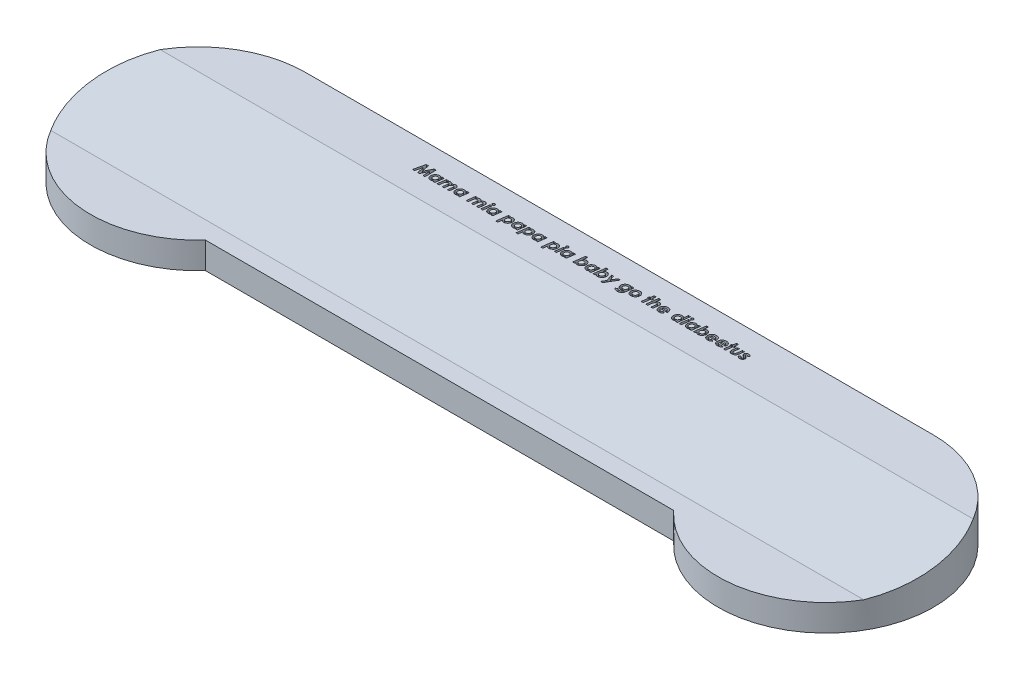
from build123d import *

# Parameters (mm, degrees)
BOSS_EXTRUDE1_DEPTH     = 15
CUT_EXTRUDE2_DEPTH      = 171.227759193
CUT_EXTRUDE2_DEPTH_BACK = 171.227759193
CUT_EXTRUDE3_DEPTH      = 5
CUT_EXTRUDE4_DEPTH      = 116.102
CUT_EXTRUDE4_DEPTH_BACK = 21
FILLET1_R               = 6.35
SKETCH5_R               = 5.08
CUT_EXTRUDE5_DEPTH      = 7.62
CUT_EXTRUDE6_DEPTH      = 1.27


with BuildPart() as part:
    # Sketch1 → Boss-Extrude1 (new body)
    with BuildSketch(Plane(origin=(0, 0, 0), x_dir=(1, 0, 0), z_dir=(0, 1, 0))):
        with BuildLine():
            Line((136.3, 30.5), (-41.5, 30.5))
            ThreePointArc((-41.5, 30.5), (-69.388169535, -12.349089035), (-18.916820419, -20.5))
            Line((-18.916820419, -20.5), (113.716820419, -20.5))
            ThreePointArc((113.716820419, -20.5), (164.188169535, -12.349089035), (136.3, 30.5))
        make_face()
    extrude(amount=BOSS_EXTRUDE1_DEPTH)

    # Sketch3 → Cut-Extrude2 (cut, two sides: drawn at the far end of the back side and taken through both)
    with BuildSketch(Plane(origin=(0, 0, 0), x_dir=(0, 0, -1), z_dir=(1, 0, 0)).offset(-CUT_EXTRUDE2_DEPTH_BACK)):
        Polygon((-30.5, 7.5), (-15.5, 7.5), (15.5, 11.817894466), (30.5, 11.817894466), (30.5, 24.944293644), (-30.5, 24.944293644), align=None)
    extrude(amount=CUT_EXTRUDE2_DEPTH + CUT_EXTRUDE2_DEPTH_BACK, mode=Mode.SUBTRACT)

    # Sketch2 → Cut-Extrude3 (cut)
    with BuildSketch(Plane(origin=(0, 0, 0), x_dir=(1, 0, 0), z_dir=(0, 1, 0))):
        with BuildLine():
            Line((136.3, 25.5), (-41.5, 25.5))
            ThreePointArc((-41.5, 25.5), (-64.36372673, -11.291589791), (-21.251543269, -15.5))
            Line((-21.251543269, -15.5), (116.051543269, -15.5))
            ThreePointArc((116.051543269, -15.5), (159.16372673, -11.291589791), (136.3, 25.5))
        make_face()
    extrude(amount=CUT_EXTRUDE3_DEPTH, mode=Mode.SUBTRACT)

    # Sketch4 → Cut-Extrude4 (cut, two sides: drawn at the far end of the back side and taken through both)
    with BuildSketch(Plane(origin=(0, 0, 0), x_dir=(0, 0, -1), z_dir=(1, 0, 0)).offset(-CUT_EXTRUDE4_DEPTH_BACK)):
        Polygon((25.5, 5), (25.5, 9.317894466), (15.5, 9.317894466), (-15.5, 5), align=None)
    extrude(amount=CUT_EXTRUDE4_DEPTH + CUT_EXTRUDE4_DEPTH_BACK, mode=Mode.SUBTRACT)

    # Fillet1
    fillet1_edges = [part.edges().sort_by_distance(p)[0] for p in [
        (47.551, 9.317894466, -15.5),
    ]]
    fillet(fillet1_edges, radius=FILLET1_R)

    # Sketch5 → Cut-Extrude5 (cut)
    with BuildSketch(Plane(origin=(0, 0, -30.5), x_dir=(-1, 0, 0), z_dir=(0, 0, -1))):
        with Locations((-85.5, 0)):
            Circle(SKETCH5_R)
        with Locations((-47.4, 0)):
            Circle(SKETCH5_R)
        with Locations((-9.3, 0)):
            Circle(SKETCH5_R)
    extrude(amount=-CUT_EXTRUDE5_DEPTH, mode=Mode.SUBTRACT)

    # Sketch6 → Cut-Extrude6 (cut)
    # profile 1 of 35: a face of its own
    with BuildSketch(Plane(origin=(0, 11.817894466, 0), x_dir=(1, 0, 0), z_dir=(0, 1, 0))):
        Polygon((-1.883465405, 25.001698886), (-1.277340605, 25.001698886), (-0.762802344, 22.789629575), (0.323515765, 25.001698886), (0.885755349, 25.001698886), (0.926460477, 21.826698886), (0.356588682, 21.826698886), (0.315883554, 23.725847524), (-0.616518289, 21.826698886), (-1.113248057, 21.826698886), (-1.576904908, 23.821250168), (-2.0456499, 21.826698886), (-2.629514083, 21.826698886), align=None)
    # profile 2 of 35: a face of its own
    with BuildSketch(Plane(origin=(0, 11.817894466, 0), x_dir=(1, 0, 0), z_dir=(0, 1, 0))):
        with BuildLine():
            Line((3.494699659, 24.146891193), (4.069659595, 24.146891193))
            Line((4.069659595, 24.146891193), (3.740202464, 21.826698886))
            Line((3.740202464, 21.826698886), (3.165242528, 21.826698886))
            Line((3.165242528, 21.826698886), (3.205311639, 22.110362748))
            add(Edge.make_bspline(
                [(3.205311639, 22.110362748), (3.175415266, 22.081905465), (3.118408186, 22.027642474), (3.030114346, 21.957245195), (2.945121186, 21.899992529), (2.861327512, 21.856080475), (2.776431746, 21.82422157), (2.688309678, 21.802155082), (2.59516946, 21.78835432), (2.531394464, 21.78679384), (2.498696054, 21.785993758)],
                knots=[0, 0, 0, 0, 1.236324186, 2.357450916, 3.379388742, 4.30284698, 5.185433758, 6.089881904, 7.020653398, 8, 8, 8, 8], degree=3))
            add(Edge.make_bspline(
                [(2.498696054, 21.785993758), (2.461321022, 21.78686446), (2.388123994, 21.788569685), (2.281349734, 21.805071266), (2.180410003, 21.830879384), (2.085257267, 21.867295429), (1.996405668, 21.914828713), (1.913004545, 21.972450438), (1.835808086, 22.040869936), (1.765875008, 22.119182191), (1.702806065, 22.203587845), (1.647948801, 22.292779949), (1.600315213, 22.384671682), (1.563239827, 22.48094181), (1.532634459, 22.579789887), (1.512146084, 22.682534256), (1.498929594, 22.788437229), (1.497204746, 22.860187398), (1.496332272, 22.896480536)],
                knots=[0, 0, 0, 0, 1.072254913, 2.099954687, 3.093402483, 4.05863531, 5.017013142, 5.979305845, 6.962352722, 7.970695896, 8.988290287, 9.983079422, 10.973839091, 11.95483031, 12.940586347, 13.940815436, 14.958409826, 16, 16, 16, 16], degree=3))
            add(Edge.make_bspline(
                [(1.496332272, 22.896480536), (1.496770046, 22.924485711), (1.497640913, 22.980196583), (1.506242194, 23.063295752), (1.520256916, 23.145263324), (1.539504991, 23.226371299), (1.563497484, 23.306597437), (1.593489747, 23.385653411), (1.62946628, 23.46338004), (1.669905581, 23.539870363), (1.714541959, 23.614201838), (1.764613981, 23.683968389), (1.817176043, 23.750445048), (1.873914148, 23.812328385), (1.9346853, 23.869416382), (1.998236763, 23.923509206), (2.066614922, 23.971986201), (2.137411974, 24.017379261), (2.211039153, 24.056904164), (2.285501106, 24.092422948), (2.361372995, 24.121378122), (2.437698008, 24.145888857), (2.515141469, 24.164295267), (2.593325243, 24.177525862), (2.672341229, 24.186306291), (2.725307282, 24.18716587), (2.75183107, 24.187596322)],
                knots=[0, 0, 0, 0, 1.010861959, 2.01091412, 3.012605424, 4.011485121, 5.018863341, 6.033918867, 7.061452407, 8.109228878, 9.15680961, 10.18900835, 11.207521355, 12.215190347, 13.216881651, 14.216552911, 15.225616441, 16.240671966, 17.251099115, 18.240697123, 19.217272556, 20.180771028, 21.133199006, 22.08832996, 23.042693801, 24, 24, 24, 24], degree=3))
            add(Edge.make_bspline(
                [(2.75183107, 24.187596322), (2.787104329, 24.186591378), (2.856632986, 24.184610489), (2.958467874, 24.166041165), (3.05602379, 24.136671709), (3.149059253, 24.095943834), (3.236430902, 24.044047512), (3.315587334, 23.980121982), (3.388317109, 23.906848604), (3.428071792, 23.850088748), (3.448270373, 23.821250168)],
                knots=[0, 0, 0, 0, 1.030509072, 2.031281277, 3.015697838, 4.003854478, 4.993584726, 5.977161716, 6.972235198, 8, 8, 8, 8], degree=3))
            Line((3.448270373, 23.821250168), (3.494699659, 24.146891193))
        make_face()
        with BuildLine():
            add(Edge.make_bspline(
                [(2.626535597, 22.315160424), (2.659690513, 22.316185195), (2.724348786, 22.318183689), (2.817762674, 22.33588711), (2.904811419, 22.363765439), (2.985363485, 22.403617571), (3.059695891, 22.456031395), (3.127168072, 22.521447792), (3.188109702, 22.599812074), (3.241554476, 22.688763279), (3.286219868, 22.78442952), (3.318945479, 22.883194239), (3.339815482, 22.983161762), (3.34215861, 23.050509677), (3.343327464, 23.084105737)],
                knots=[0, 0, 0, 0, 1.017901168, 1.985097214, 2.910041334, 3.818973104, 4.735274743, 5.693545178, 6.695670165, 7.777101795, 8.875856117, 9.932619244, 10.968700869, 12, 12, 12, 12], degree=3))
            add(Edge.make_bspline(
                [(3.343327464, 23.084105737), (3.342792762, 23.105111518), (3.341741956, 23.146392494), (3.334873113, 23.206674826), (3.322798133, 23.263780111), (3.305472619, 23.317673072), (3.283341878, 23.368411667), (3.256241892, 23.416144642), (3.224559627, 23.460537773), (3.188143317, 23.501553142), (3.147447988, 23.537891052), (3.104299635, 23.571204725), (3.056692323, 23.59736424), (3.006933718, 23.620191593), (2.953664079, 23.637029809), (2.89760837, 23.650149379), (2.838066136, 23.656817753), (2.797425789, 23.657884135), (2.776635757, 23.658429655)],
                knots=[0, 0, 0, 0, 1.109141645, 2.179707075, 3.198451464, 4.18615572, 5.163657463, 6.116161664, 7.079133258, 8.038519567, 9.005387219, 9.956904198, 10.909408399, 11.866440704, 12.843493655, 13.853714903, 14.902043453, 16, 16, 16, 16], degree=3))
            add(Edge.make_bspline(
                [(2.776635757, 23.658429655), (2.752425747, 23.657901197), (2.704632046, 23.656857951), (2.634399775, 23.646083234), (2.566660557, 23.629995259), (2.502070243, 23.60592033), (2.439954908, 23.576247473), (2.381280404, 23.538757802), (2.324905965, 23.495317572), (2.272028497, 23.445514369), (2.223797656, 23.390408602), (2.181585366, 23.330961032), (2.145663168, 23.267510649), (2.116392586, 23.200156668), (2.094231174, 23.128610446), (2.07755609, 23.053796491), (2.067951982, 22.974748708), (2.066796087, 22.92088703), (2.066204066, 22.893300448)],
                knots=[0, 0, 0, 0, 0.994897251, 1.964056203, 2.915642991, 3.853470011, 4.79324038, 5.741466074, 6.711095529, 7.716481674, 8.723680824, 9.71796663, 10.70964959, 11.717112863, 12.731868792, 13.785363818, 14.865719672, 16, 16, 16, 16], degree=3))
            add(Edge.make_bspline(
                [(2.066204066, 22.893300448), (2.066748312, 22.872085891), (2.067812628, 22.830599062), (2.074505323, 22.769804779), (2.087538679, 22.712440047), (2.104653083, 22.658131264), (2.126243361, 22.606826132), (2.153134633, 22.558838294), (2.185150575, 22.514078147), (2.221830098, 22.472909501), (2.26267391, 22.436259769), (2.305957407, 22.403328664), (2.352609443, 22.376062996), (2.401993212, 22.353516502), (2.454289567, 22.336383597), (2.509313131, 22.324562167), (2.566936772, 22.31647678), (2.60636615, 22.315605906), (2.626535597, 22.315160424)],
                knots=[0, 0, 0, 0, 1.124431694, 2.198919568, 3.234766021, 4.236791382, 5.213425507, 6.179206721, 7.145706547, 8.12447102, 9.094881178, 10.04988442, 11.001776355, 11.952075609, 12.922030374, 13.911569148, 14.931697721, 16, 16, 16, 16], degree=3))
        make_face(mode=Mode.SUBTRACT)
    # profile 3 of 35: a face of its own
    with BuildSketch(Plane(origin=(0, 11.817894466, 0), x_dir=(1, 0, 0), z_dir=(0, 1, 0))):
        with BuildLine():
            Line((4.675148377, 24.146891193), (5.250108313, 24.146891193))
            Line((5.250108313, 24.146891193), (5.215763361, 23.907748565))
            add(Edge.make_bspline(
                [(5.215763361, 23.907748565), (5.241726524, 23.929986522), (5.292760243, 23.973697902), (5.373677895, 24.031365129), (5.457660763, 24.079149035), (5.543511416, 24.118907349), (5.631998532, 24.149466959), (5.722561818, 24.172151396), (5.815802392, 24.184842341), (5.878669938, 24.186674619), (5.910294611, 24.187596322)],
                knots=[0, 0, 0, 0, 1.069977143, 2.103168785, 3.105121407, 4.091183962, 5.061005303, 6.031757495, 7.009902082, 8, 8, 8, 8], degree=3))
            add(Edge.make_bspline(
                [(5.910294611, 24.187596322), (5.935985155, 24.187061909), (5.986726794, 24.186006387), (6.061204038, 24.175335157), (6.133307097, 24.159016762), (6.201707497, 24.135192231), (6.266519857, 24.107862358), (6.324921342, 24.07533933), (6.377165475, 24.039640981), (6.423297505, 23.999339914), (6.465238134, 23.95316129), (6.502086318, 23.898445977), (6.537748058, 23.836784458), (6.556782083, 23.791392698), (6.566664804, 23.767824687)],
                knots=[0, 0, 0, 0, 1.109957993, 2.192288655, 3.24610864, 4.301123658, 5.319265493, 6.283375103, 7.185921217, 8.049852935, 8.925950585, 9.874291138, 10.896303465, 12, 12, 12, 12], degree=3))
            add(Edge.make_bspline(
                [(6.566664804, 23.767824687), (6.593905167, 23.800740421), (6.64747852, 23.86547547), (6.739576409, 23.94944234), (6.837330181, 24.022205491), (6.941844419, 24.081974741), (7.050967765, 24.128875392), (7.162862824, 24.163044945), (7.277002914, 24.183245596), (7.353765155, 24.186144332), (7.392215685, 24.187596322)],
                knots=[0, 0, 0, 0, 1.068507855, 2.101423812, 3.110961205, 4.114256546, 5.108072785, 6.078570018, 7.037547632, 8, 8, 8, 8], degree=3))
            add(Edge.make_bspline(
                [(7.392215685, 24.187596322), (7.416199647, 24.186958394), (7.463275532, 24.185706265), (7.532058428, 24.176688204), (7.597606049, 24.161928408), (7.660199211, 24.141745444), (7.719755937, 24.114916137), (7.775608354, 24.081451507), (7.829093455, 24.043273535), (7.878128446, 23.998720205), (7.923429228, 23.950221481), (7.962440495, 23.896911788), (7.995293374, 23.840253063), (8.023371406, 23.780496726), (8.044103197, 23.716781864), (8.05861492, 23.649417273), (8.067694898, 23.578749515), (8.06894024, 23.530405654), (8.069574459, 23.505785424)],
                knots=[0, 0, 0, 0, 1.067579149, 2.095451666, 3.082336747, 4.055358798, 5.01848865, 5.983235772, 6.949873969, 7.939058171, 8.927611774, 9.899809502, 10.872694214, 11.83974703, 12.83364797, 13.848173759, 14.90413271, 16, 16, 16, 16], degree=3))
            add(Edge.make_bspline(
                [(8.069574459, 23.505785424), (8.069288024, 23.485640979), (8.068681548, 23.442988582), (8.064789756, 23.375505638), (8.057394598, 23.30114235), (8.051610174, 23.24925176), (8.048585877, 23.222121562)],
                knots=[0, 0, 0, 0, 0.849407055, 1.7984733, 2.848965608, 4, 4, 4, 4], degree=3))
            Line((8.048585877, 23.222121562), (7.851420413, 21.826698886))
            Line((7.851420413, 21.826698886), (7.276460477, 21.826698886))
            Line((7.276460477, 21.826698886), (7.446277183, 23.02686415))
            add(Edge.make_bspline(
                [(7.446277183, 23.02686415), (7.448886391, 23.045512245), (7.453864145, 23.081088419), (7.459957805, 23.132031208), (7.465993837, 23.177762577), (7.470236228, 23.218729551), (7.474245019, 23.25473037), (7.476872771, 23.285903308), (7.478105911, 23.312215416), (7.478524431, 23.328123855), (7.478714083, 23.3353327)],
                knots=[0, 0, 0, 0, 1.456211658, 2.778109005, 3.967816617, 5.02342619, 5.963168411, 6.769250698, 7.442290898, 8, 8, 8, 8], degree=3))
            add(Edge.make_bspline(
                [(7.478714083, 23.3353327), (7.477846076, 23.360219445), (7.476202491, 23.4073429), (7.461082897, 23.473611323), (7.434780288, 23.530383743), (7.397667898, 23.577408079), (7.351039145, 23.613954234), (7.296114368, 23.64076877), (7.232518435, 23.655833152), (7.187498023, 23.657536349), (7.163885357, 23.658429655)],
                knots=[0, 0, 0, 0, 1.161761691, 2.199814624, 3.152587086, 4.062310516, 4.972033945, 5.898009449, 6.89753113, 8, 8, 8, 8], degree=3))
            add(Edge.make_bspline(
                [(7.163885357, 23.658429655), (7.139376415, 23.657194937), (7.089633527, 23.654688975), (7.015591342, 23.634014894), (6.940920051, 23.60268293), (6.867908854, 23.558241331), (6.798509604, 23.504659639), (6.737222436, 23.440991518), (6.68404662, 23.369714841), (6.647896882, 23.302495102), (6.622387905, 23.242285833), (6.604478001, 23.189001178), (6.586494063, 23.12862843), (6.570351883, 23.060534363), (6.553566875, 22.98517885), (6.53854194, 22.901977992), (6.524795651, 22.811331797), (6.515936523, 22.748508862), (6.51133127, 22.71585153)],
                knots=[0, 0, 0, 0, 0.93151218, 1.890579642, 2.906747472, 4.006976104, 5.133726416, 6.235138153, 7.360066483, 8.508370064, 9.13036193, 9.847472292, 10.646694045, 11.527433134, 12.510375326, 13.585094536, 14.744656403, 16, 16, 16, 16], degree=3))
            Line((6.51133127, 22.71585153), (6.386035797, 21.826698886))
            Line((6.386035797, 21.826698886), (5.811075861, 21.826698886))
            Line((5.811075861, 21.826698886), (5.990432833, 23.097462107))
            add(Edge.make_bspline(
                [(5.990432833, 23.097462107), (5.993474806, 23.120773136), (5.999358447, 23.165860229), (6.00660906, 23.230693506), (6.01057319, 23.29054875), (6.011146316, 23.328543628), (6.011421414, 23.346781017)],
                knots=[0, 0, 0, 0, 1.126647165, 2.179107802, 3.125979013, 4, 4, 4, 4], degree=3))
            add(Edge.make_bspline(
                [(6.011421414, 23.346781017), (6.010362887, 23.369572753), (6.008323902, 23.413475294), (5.991633418, 23.475488014), (5.963673233, 23.530160098), (5.924330509, 23.575994626), (5.876414724, 23.613374654), (5.820284484, 23.639551957), (5.757522467, 23.656028415), (5.713237904, 23.657608708), (5.690232512, 23.658429655)],
                knots=[0, 0, 0, 0, 1.082943702, 2.08601841, 3.028769941, 3.980487733, 4.936683719, 5.897548763, 6.907797403, 8, 8, 8, 8], degree=3))
            add(Edge.make_bspline(
                [(5.690232512, 23.658429655), (5.666796114, 23.657353397), (5.619050669, 23.655160806), (5.547621083, 23.635802151), (5.475222512, 23.606485621), (5.40393823, 23.56515501), (5.335284924, 23.515227556), (5.274604381, 23.454507385), (5.221319772, 23.386086602), (5.184274753, 23.321986286), (5.157931106, 23.265426698), (5.139867458, 23.216769472), (5.121828822, 23.16305947), (5.106413029, 23.103593264), (5.091070446, 23.039150326), (5.076256835, 22.96947876), (5.063885657, 22.894046527), (5.056255936, 22.842006127), (5.052306831, 22.81507028)],
                knots=[0, 0, 0, 0, 0.967225309, 1.970464972, 3.039669034, 4.189715437, 5.367573998, 6.538795578, 7.725553569, 8.943041978, 9.590012408, 10.302892929, 11.087180491, 11.931136338, 12.840913691, 13.825764991, 14.874626956, 16, 16, 16, 16], degree=3))
            Line((5.052306831, 22.81507028), (4.920651182, 21.826698886))
            Line((4.920651182, 21.826698886), (4.345691246, 21.826698886))
            Line((4.345691246, 21.826698886), (4.675148377, 24.146891193))
        make_face()
    # profile 4 of 35: a face of its own
    with BuildSketch(Plane(origin=(0, 11.817894466, 0), x_dir=(1, 0, 0), z_dir=(0, 1, 0))):
        with BuildLine():
            Line((10.536686839, 24.146891193), (11.111646775, 24.146891193))
            Line((11.111646775, 24.146891193), (10.782189643, 21.826698886))
            Line((10.782189643, 21.826698886), (10.207229708, 21.826698886))
            Line((10.207229708, 21.826698886), (10.247298818, 22.110362748))
            add(Edge.make_bspline(
                [(10.247298818, 22.110362748), (10.217402445, 22.081905465), (10.160395365, 22.027642474), (10.072101526, 21.957245195), (9.987108366, 21.899992529), (9.903314692, 21.856080475), (9.818418926, 21.82422157), (9.730296857, 21.802155082), (9.637156639, 21.78835432), (9.573381644, 21.78679384), (9.540683233, 21.785993758)],
                knots=[0, 0, 0, 0, 1.236324186, 2.357450916, 3.379388742, 4.30284698, 5.185433758, 6.089881904, 7.020653398, 8, 8, 8, 8], degree=3))
            add(Edge.make_bspline(
                [(9.540683233, 21.785993758), (9.503308202, 21.78686446), (9.430111174, 21.788569685), (9.323336914, 21.805071266), (9.222397183, 21.830879384), (9.127244447, 21.867295429), (9.038392848, 21.914828713), (8.954991725, 21.972450438), (8.877795265, 22.040869936), (8.807862188, 22.119182191), (8.744793244, 22.203587845), (8.689935981, 22.292779949), (8.642302393, 22.384671682), (8.605227007, 22.48094181), (8.574621639, 22.579789887), (8.554133263, 22.682534256), (8.540916774, 22.788437229), (8.539191925, 22.860187398), (8.538319451, 22.896480536)],
                knots=[0, 0, 0, 0, 1.072254913, 2.099954687, 3.093402483, 4.05863531, 5.017013142, 5.979305845, 6.962352722, 7.970695896, 8.988290287, 9.983079422, 10.973839091, 11.95483031, 12.940586347, 13.940815436, 14.958409826, 16, 16, 16, 16], degree=3))
            add(Edge.make_bspline(
                [(8.538319451, 22.896480536), (8.538757225, 22.924485711), (8.539628092, 22.980196583), (8.548229373, 23.063295752), (8.562244096, 23.145263324), (8.581492171, 23.226371299), (8.605484663, 23.306597437), (8.635476926, 23.385653411), (8.67145346, 23.46338004), (8.71189276, 23.539870363), (8.756529139, 23.614201838), (8.806601161, 23.683968389), (8.859163223, 23.750445048), (8.915901327, 23.812328385), (8.97667248, 23.869416382), (9.040223943, 23.923509206), (9.108602102, 23.971986201), (9.179399153, 24.017379261), (9.253026333, 24.056904164), (9.327488286, 24.092422948), (9.403360174, 24.121378122), (9.479685188, 24.145888857), (9.557128649, 24.164295267), (9.635312423, 24.177525862), (9.714328408, 24.186306291), (9.767294461, 24.18716587), (9.793818249, 24.187596322)],
                knots=[0, 0, 0, 0, 1.010861959, 2.01091412, 3.012605424, 4.011485121, 5.018863341, 6.033918867, 7.061452407, 8.109228878, 9.15680961, 10.18900835, 11.207521355, 12.215190347, 13.216881651, 14.216552911, 15.225616441, 16.240671966, 17.251099115, 18.240697123, 19.217272556, 20.180771028, 21.133199006, 22.08832996, 23.042693801, 24, 24, 24, 24], degree=3))
            add(Edge.make_bspline(
                [(9.793818249, 24.187596322), (9.829091509, 24.186591378), (9.898620166, 24.184610489), (10.000455053, 24.166041165), (10.09801097, 24.136671709), (10.191046433, 24.095943834), (10.278418082, 24.044047512), (10.357574513, 23.980121982), (10.430304289, 23.906848604), (10.470058971, 23.850088748), (10.490257552, 23.821250168)],
                knots=[0, 0, 0, 0, 1.030509072, 2.031281277, 3.015697838, 4.003854478, 4.993584726, 5.977161716, 6.972235198, 8, 8, 8, 8], degree=3))
            Line((10.490257552, 23.821250168), (10.536686839, 24.146891193))
        make_face()
        with BuildLine():
            add(Edge.make_bspline(
                [(9.668522776, 22.315160424), (9.701677692, 22.316185195), (9.766335965, 22.318183689), (9.859749854, 22.33588711), (9.946798598, 22.363765439), (10.027350665, 22.403617571), (10.10168307, 22.456031395), (10.169155252, 22.521447792), (10.230096882, 22.599812074), (10.283541656, 22.688763279), (10.328207047, 22.78442952), (10.360932658, 22.883194239), (10.381802661, 22.983161762), (10.38414579, 23.050509677), (10.385314643, 23.084105737)],
                knots=[0, 0, 0, 0, 1.017901168, 1.985097214, 2.910041334, 3.818973104, 4.735274743, 5.693545178, 6.695670165, 7.777101795, 8.875856117, 9.932619244, 10.968700869, 12, 12, 12, 12], degree=3))
            add(Edge.make_bspline(
                [(10.385314643, 23.084105737), (10.384779942, 23.105111518), (10.383729135, 23.146392494), (10.376860293, 23.206674826), (10.364785312, 23.263780111), (10.347459799, 23.317673072), (10.325329057, 23.368411667), (10.298229072, 23.416144642), (10.266546806, 23.460537773), (10.230130496, 23.501553142), (10.189435168, 23.537891052), (10.146286814, 23.571204725), (10.098679503, 23.59736424), (10.048920898, 23.620191593), (9.995651259, 23.637029809), (9.939595549, 23.650149379), (9.880053316, 23.656817753), (9.839412968, 23.657884135), (9.818622937, 23.658429655)],
                knots=[0, 0, 0, 0, 1.109141645, 2.179707075, 3.198451464, 4.18615572, 5.163657463, 6.116161664, 7.079133258, 8.038519567, 9.005387219, 9.956904198, 10.909408399, 11.866440704, 12.843493655, 13.853714903, 14.902043453, 16, 16, 16, 16], degree=3))
            add(Edge.make_bspline(
                [(9.818622937, 23.658429655), (9.794412926, 23.657901197), (9.746619225, 23.656857951), (9.676386955, 23.646083234), (9.608647736, 23.629995259), (9.544057422, 23.60592033), (9.481942088, 23.576247473), (9.423267583, 23.538757802), (9.366893144, 23.495317572), (9.314015676, 23.445514369), (9.265784836, 23.390408602), (9.223572546, 23.330961032), (9.187650348, 23.267510649), (9.158379766, 23.200156668), (9.136218353, 23.128610446), (9.119543269, 23.053796491), (9.109939161, 22.974748708), (9.108783266, 22.92088703), (9.108191246, 22.893300448)],
                knots=[0, 0, 0, 0, 0.994897251, 1.964056203, 2.915642991, 3.853470011, 4.79324038, 5.741466074, 6.711095529, 7.716481674, 8.723680824, 9.71796663, 10.70964959, 11.717112863, 12.731868792, 13.785363818, 14.865719672, 16, 16, 16, 16], degree=3))
            add(Edge.make_bspline(
                [(9.108191246, 22.893300448), (9.108735491, 22.872085891), (9.109799808, 22.830599062), (9.116492503, 22.769804779), (9.129525859, 22.712440047), (9.146640263, 22.658131264), (9.16823054, 22.606826132), (9.195121812, 22.558838294), (9.227137754, 22.514078147), (9.263817278, 22.472909501), (9.304661089, 22.436259769), (9.347944587, 22.403328664), (9.394596622, 22.376062996), (9.443980392, 22.353516502), (9.496276746, 22.336383597), (9.551300311, 22.324562167), (9.608923952, 22.31647678), (9.64835333, 22.315605906), (9.668522776, 22.315160424)],
                knots=[0, 0, 0, 0, 1.124431694, 2.198919568, 3.234766021, 4.236791382, 5.213425507, 6.179206721, 7.145706547, 8.12447102, 9.094881178, 10.04988442, 11.001776355, 11.952075609, 12.922030374, 13.911569148, 14.931697721, 16, 16, 16, 16], degree=3))
        make_face(mode=Mode.SUBTRACT)
    # profile 5 of 35: a face of its own
    with BuildSketch(Plane(origin=(0, 11.817894466, 0), x_dir=(1, 0, 0), z_dir=(0, 1, 0))):
        with BuildLine():
            Line((12.938289403, 24.146891193), (13.513249339, 24.146891193))
            Line((13.513249339, 24.146891193), (13.478904387, 23.907748565))
            add(Edge.make_bspline(
                [(13.478904387, 23.907748565), (13.50486755, 23.929986522), (13.555901269, 23.973697902), (13.636818921, 24.031365129), (13.720801788, 24.079149035), (13.806652442, 24.118907349), (13.895139557, 24.149466959), (13.985702844, 24.172151396), (14.078943417, 24.184842341), (14.141810963, 24.186674619), (14.173435637, 24.187596322)],
                knots=[0, 0, 0, 0, 1.069977143, 2.103168785, 3.105121407, 4.091183962, 5.061005303, 6.031757495, 7.009902082, 8, 8, 8, 8], degree=3))
            add(Edge.make_bspline(
                [(14.173435637, 24.187596322), (14.199126181, 24.187061909), (14.249867819, 24.186006387), (14.324345064, 24.175335157), (14.396448123, 24.159016762), (14.464848523, 24.135192231), (14.529660882, 24.107862358), (14.588062367, 24.07533933), (14.6403065, 24.039640981), (14.686438531, 23.999339914), (14.728379159, 23.95316129), (14.765227344, 23.898445977), (14.800889084, 23.836784458), (14.819923109, 23.791392698), (14.829805829, 23.767824687)],
                knots=[0, 0, 0, 0, 1.109957993, 2.192288655, 3.24610864, 4.301123658, 5.319265493, 6.283375103, 7.185921217, 8.049852935, 8.925950585, 9.874291138, 10.896303465, 12, 12, 12, 12], degree=3))
            add(Edge.make_bspline(
                [(14.829805829, 23.767824687), (14.857046193, 23.800740421), (14.910619546, 23.86547547), (15.002717435, 23.94944234), (15.100471207, 24.022205491), (15.204985445, 24.081974741), (15.314108791, 24.128875392), (15.42600385, 24.163044945), (15.54014394, 24.183245596), (15.616906181, 24.186144332), (15.655356711, 24.187596322)],
                knots=[0, 0, 0, 0, 1.068507855, 2.101423812, 3.110961205, 4.114256546, 5.108072785, 6.078570018, 7.037547632, 8, 8, 8, 8], degree=3))
            add(Edge.make_bspline(
                [(15.655356711, 24.187596322), (15.679340673, 24.186958394), (15.726416558, 24.185706265), (15.795199454, 24.176688204), (15.860747075, 24.161928408), (15.923340237, 24.141745444), (15.982896962, 24.114916137), (16.03874938, 24.081451507), (16.092234481, 24.043273535), (16.141269472, 23.998720205), (16.186570254, 23.950221481), (16.225581521, 23.896911788), (16.2584344, 23.840253063), (16.286512431, 23.780496726), (16.307244222, 23.716781864), (16.321755946, 23.649417273), (16.330835923, 23.578749515), (16.332081265, 23.530405654), (16.332715485, 23.505785424)],
                knots=[0, 0, 0, 0, 1.067579149, 2.095451666, 3.082336747, 4.055358798, 5.01848865, 5.983235772, 6.949873969, 7.939058171, 8.927611774, 9.899809502, 10.872694214, 11.83974703, 12.83364797, 13.848173759, 14.90413271, 16, 16, 16, 16], degree=3))
            add(Edge.make_bspline(
                [(16.332715485, 23.505785424), (16.33242905, 23.485640979), (16.331822573, 23.442988582), (16.327930782, 23.375505638), (16.320535624, 23.30114235), (16.3147512, 23.24925176), (16.311726903, 23.222121562)],
                knots=[0, 0, 0, 0, 0.849407055, 1.7984733, 2.848965608, 4, 4, 4, 4], degree=3))
            Line((16.311726903, 23.222121562), (16.114561438, 21.826698886))
            Line((16.114561438, 21.826698886), (15.539601502, 21.826698886))
            Line((15.539601502, 21.826698886), (15.709418209, 23.02686415))
            add(Edge.make_bspline(
                [(15.709418209, 23.02686415), (15.712027417, 23.045512245), (15.717005171, 23.081088419), (15.723098831, 23.132031208), (15.729134862, 23.177762577), (15.733377254, 23.218729551), (15.737386045, 23.25473037), (15.740013796, 23.285903308), (15.741246936, 23.312215416), (15.741665457, 23.328123855), (15.741855108, 23.3353327)],
                knots=[0, 0, 0, 0, 1.456211658, 2.778109005, 3.967816617, 5.02342619, 5.963168411, 6.769250698, 7.442290898, 8, 8, 8, 8], degree=3))
            add(Edge.make_bspline(
                [(15.741855108, 23.3353327), (15.740987102, 23.360219445), (15.739343517, 23.4073429), (15.724223923, 23.473611323), (15.697921314, 23.530383743), (15.660808924, 23.577408079), (15.614180171, 23.613954234), (15.559255394, 23.64076877), (15.495659461, 23.655833152), (15.450639049, 23.657536349), (15.427026382, 23.658429655)],
                knots=[0, 0, 0, 0, 1.161761691, 2.199814624, 3.152587086, 4.062310516, 4.972033945, 5.898009449, 6.89753113, 8, 8, 8, 8], degree=3))
            add(Edge.make_bspline(
                [(15.427026382, 23.658429655), (15.40251744, 23.657194937), (15.352774552, 23.654688975), (15.278732367, 23.634014894), (15.204061077, 23.60268293), (15.131049879, 23.558241331), (15.06165063, 23.504659639), (15.000363462, 23.440991518), (14.947187645, 23.369714841), (14.911037907, 23.302495102), (14.885528931, 23.242285833), (14.867619027, 23.189001178), (14.849635088, 23.12862843), (14.833492909, 23.060534363), (14.816707901, 22.98517885), (14.801682966, 22.901977992), (14.787936677, 22.811331797), (14.779077548, 22.748508862), (14.774472296, 22.71585153)],
                knots=[0, 0, 0, 0, 0.93151218, 1.890579642, 2.906747472, 4.006976104, 5.133726416, 6.235138153, 7.360066483, 8.508370064, 9.13036193, 9.847472292, 10.646694045, 11.527433134, 12.510375326, 13.585094536, 14.744656403, 16, 16, 16, 16], degree=3))
            Line((14.774472296, 22.71585153), (14.649176823, 21.826698886))
            Line((14.649176823, 21.826698886), (14.074216887, 21.826698886))
            Line((14.074216887, 21.826698886), (14.253573858, 23.097462107))
            add(Edge.make_bspline(
                [(14.253573858, 23.097462107), (14.256615831, 23.120773136), (14.262499473, 23.165860229), (14.269750085, 23.230693506), (14.273714215, 23.29054875), (14.274287342, 23.328543628), (14.27456244, 23.346781017)],
                knots=[0, 0, 0, 0, 1.126647165, 2.179107802, 3.125979013, 4, 4, 4, 4], degree=3))
            add(Edge.make_bspline(
                [(14.27456244, 23.346781017), (14.273503913, 23.369572753), (14.271464928, 23.413475294), (14.254774443, 23.475488014), (14.226814258, 23.530160098), (14.187471535, 23.575994626), (14.139555749, 23.613374654), (14.083425509, 23.639551957), (14.020663493, 23.656028415), (13.97637893, 23.657608708), (13.953373538, 23.658429655)],
                knots=[0, 0, 0, 0, 1.082943702, 2.08601841, 3.028769941, 3.980487733, 4.936683719, 5.897548763, 6.907797403, 8, 8, 8, 8], degree=3))
            add(Edge.make_bspline(
                [(13.953373538, 23.658429655), (13.929937139, 23.657353397), (13.882191695, 23.655160806), (13.810762109, 23.635802151), (13.738363538, 23.606485621), (13.667079256, 23.56515501), (13.598425949, 23.515227556), (13.537745407, 23.454507385), (13.484460798, 23.386086602), (13.447415779, 23.321986286), (13.421072132, 23.265426698), (13.403008484, 23.216769472), (13.384969848, 23.16305947), (13.369554055, 23.103593264), (13.354211472, 23.039150326), (13.33939786, 22.96947876), (13.327026682, 22.894046527), (13.319396962, 22.842006127), (13.315447857, 22.81507028)],
                knots=[0, 0, 0, 0, 0.967225309, 1.970464972, 3.039669034, 4.189715437, 5.367573998, 6.538795578, 7.725553569, 8.943041978, 9.590012408, 10.302892929, 11.087180491, 11.931136338, 12.840913691, 13.825764991, 14.874626956, 16, 16, 16, 16], degree=3))
            Line((13.315447857, 22.81507028), (13.183792208, 21.826698886))
            Line((13.183792208, 21.826698886), (12.608832272, 21.826698886))
            Line((12.608832272, 21.826698886), (12.938289403, 24.146891193))
        make_face()
    # profile 6 of 35: a face of its own
    with BuildSketch(Plane(origin=(0, 11.817894466, 0), x_dir=(1, 0, 0), z_dir=(0, 1, 0))):
        with BuildLine():
            add(Edge.make_bspline(
                [(17.452742528, 25.12381427), (17.47703081, 25.122397967), (17.524740125, 25.119615933), (17.593925247, 25.09962974), (17.656382151, 25.063881691), (17.712597284, 25.017322872), (17.759156102, 24.96110774), (17.794904151, 24.898650835), (17.814890344, 24.829465714), (17.817672379, 24.781756399), (17.819088682, 24.757468117)],
                knots=[0, 0, 0, 0, 1.014134371, 1.992057583, 2.975098753, 4, 5.024901247, 6.007942417, 6.985865629, 8, 8, 8, 8], degree=3))
            add(Edge.make_bspline(
                [(17.819088682, 24.757468117), (17.817682036, 24.733174347), (17.81491897, 24.685454251), (17.794741765, 24.616167976), (17.759375718, 24.553271576), (17.712542825, 24.497043754), (17.656574264, 24.45028847), (17.593730359, 24.415447863), (17.52476501, 24.39527595), (17.477039205, 24.392523304), (17.452742528, 24.391121963)],
                knots=[0, 0, 0, 0, 1.013694729, 1.991193998, 2.981551723, 4.006008661, 5.030465598, 6.008806002, 6.986305271, 8, 8, 8, 8], degree=3))
            add(Edge.make_bspline(
                [(17.452742528, 24.391121963), (17.42844049, 24.392513719), (17.380704155, 24.395247538), (17.311635249, 24.415610016), (17.248355956, 24.450069047), (17.192371893, 24.497097482), (17.145343459, 24.553081544), (17.110884428, 24.616360837), (17.090521949, 24.685429743), (17.087788131, 24.733166079), (17.086396374, 24.757468117)],
                knots=[0, 0, 0, 0, 1.01324697, 1.990314468, 2.975995575, 4, 5.024004425, 6.009685532, 6.98675303, 8, 8, 8, 8], degree=3))
            add(Edge.make_bspline(
                [(17.086396374, 24.757468117), (17.087797715, 24.781764793), (17.090550361, 24.829490598), (17.110722275, 24.898455947), (17.145562881, 24.961299852), (17.192318165, 25.017268413), (17.248545988, 25.064101306), (17.311442388, 25.099467353), (17.380728663, 25.119644559), (17.428448758, 25.122407624), (17.452742528, 25.12381427)],
                knots=[0, 0, 0, 0, 1.013694729, 1.991193998, 2.969534402, 3.993991339, 5.018448277, 6.008806002, 6.986305271, 8, 8, 8, 8], degree=3))
        make_face()
    # profile 7 of 35: a face of its own
    with BuildSketch(Plane(origin=(0, 11.817894466, 0), x_dir=(1, 0, 0), z_dir=(0, 1, 0))):
        Polygon((17.049507352, 24.146891193), (17.624467288, 24.146891193), (17.295010156, 21.826698886), (16.72005022, 21.826698886), align=None)
    # profile 8 of 35: a face of its own
    with BuildSketch(Plane(origin=(0, 11.817894466, 0), x_dir=(1, 0, 0), z_dir=(0, 1, 0))):
        with BuildLine():
            Line((19.858161198, 24.146891193), (20.433121134, 24.146891193))
            Line((20.433121134, 24.146891193), (20.103664002, 21.826698886))
            Line((20.103664002, 21.826698886), (19.528704066, 21.826698886))
            Line((19.528704066, 21.826698886), (19.568773177, 22.110362748))
            add(Edge.make_bspline(
                [(19.568773177, 22.110362748), (19.538876804, 22.081905465), (19.481869724, 22.027642474), (19.393575885, 21.957245195), (19.308582725, 21.899992529), (19.224789051, 21.856080475), (19.139893285, 21.82422157), (19.051771216, 21.802155082), (18.958630998, 21.78835432), (18.894856003, 21.78679384), (18.862157592, 21.785993758)],
                knots=[0, 0, 0, 0, 1.236324186, 2.357450916, 3.379388742, 4.30284698, 5.185433758, 6.089881904, 7.020653398, 8, 8, 8, 8], degree=3))
            add(Edge.make_bspline(
                [(18.862157592, 21.785993758), (18.82478256, 21.78686446), (18.751585533, 21.788569685), (18.644811273, 21.805071266), (18.543871542, 21.830879384), (18.448718806, 21.867295429), (18.359867207, 21.914828713), (18.276466084, 21.972450438), (18.199269624, 22.040869936), (18.129336547, 22.119182191), (18.066267603, 22.203587845), (18.01141034, 22.292779949), (17.963776752, 22.384671682), (17.926701366, 22.48094181), (17.896095998, 22.579789887), (17.875607622, 22.682534256), (17.862391133, 22.788437229), (17.860666284, 22.860187398), (17.85979381, 22.896480536)],
                knots=[0, 0, 0, 0, 1.072254913, 2.099954687, 3.093402483, 4.05863531, 5.017013142, 5.979305845, 6.962352722, 7.970695896, 8.988290287, 9.983079422, 10.973839091, 11.95483031, 12.940586347, 13.940815436, 14.958409826, 16, 16, 16, 16], degree=3))
            add(Edge.make_bspline(
                [(17.85979381, 22.896480536), (17.860231584, 22.924485711), (17.861102451, 22.980196583), (17.869703732, 23.063295752), (17.883718455, 23.145263324), (17.902966529, 23.226371299), (17.926959022, 23.306597437), (17.956951285, 23.385653411), (17.992927819, 23.46338004), (18.033367119, 23.539870363), (18.078003498, 23.614201838), (18.12807552, 23.683968389), (18.180637581, 23.750445048), (18.237375686, 23.812328385), (18.298146839, 23.869416382), (18.361698302, 23.923509206), (18.430076461, 23.971986201), (18.500873512, 24.017379261), (18.574500692, 24.056904164), (18.648962645, 24.092422948), (18.724834533, 24.121378122), (18.801159547, 24.145888857), (18.878603008, 24.164295267), (18.956786782, 24.177525862), (19.035802767, 24.186306291), (19.08876882, 24.18716587), (19.115292608, 24.187596322)],
                knots=[0, 0, 0, 0, 1.010861959, 2.01091412, 3.012605424, 4.011485121, 5.018863341, 6.033918867, 7.061452407, 8.109228878, 9.15680961, 10.18900835, 11.207521355, 12.215190347, 13.216881651, 14.216552911, 15.225616441, 16.240671966, 17.251099115, 18.240697123, 19.217272556, 20.180771028, 21.133199006, 22.08832996, 23.042693801, 24, 24, 24, 24], degree=3))
            add(Edge.make_bspline(
                [(19.115292608, 24.187596322), (19.150565868, 24.186591378), (19.220094525, 24.184610489), (19.321929412, 24.166041165), (19.419485329, 24.136671709), (19.512520792, 24.095943834), (19.599892441, 24.044047512), (19.679048872, 23.980121982), (19.751778648, 23.906848604), (19.79153333, 23.850088748), (19.811731911, 23.821250168)],
                knots=[0, 0, 0, 0, 1.030509072, 2.031281277, 3.015697838, 4.003854478, 4.993584726, 5.977161716, 6.972235198, 8, 8, 8, 8], degree=3))
            Line((19.811731911, 23.821250168), (19.858161198, 24.146891193))
        make_face()
        with BuildLine():
            add(Edge.make_bspline(
                [(18.989997135, 22.315160424), (19.023152051, 22.316185195), (19.087810324, 22.318183689), (19.181224213, 22.33588711), (19.268272957, 22.363765439), (19.348825024, 22.403617571), (19.423157429, 22.456031395), (19.490629611, 22.521447792), (19.551571241, 22.599812074), (19.605016015, 22.688763279), (19.649681406, 22.78442952), (19.682407017, 22.883194239), (19.70327702, 22.983161762), (19.705620149, 23.050509677), (19.706789002, 23.084105737)],
                knots=[0, 0, 0, 0, 1.017901168, 1.985097214, 2.910041334, 3.818973104, 4.735274743, 5.693545178, 6.695670165, 7.777101795, 8.875856117, 9.932619244, 10.968700869, 12, 12, 12, 12], degree=3))
            add(Edge.make_bspline(
                [(19.706789002, 23.084105737), (19.706254301, 23.105111518), (19.705203494, 23.146392494), (19.698334652, 23.206674826), (19.686259671, 23.263780111), (19.668934158, 23.317673072), (19.646803416, 23.368411667), (19.619703431, 23.416144642), (19.588021165, 23.460537773), (19.551604855, 23.501553142), (19.510909527, 23.537891052), (19.467761173, 23.571204725), (19.420153862, 23.59736424), (19.370395257, 23.620191593), (19.317125618, 23.637029809), (19.261069908, 23.650149379), (19.201527675, 23.656817753), (19.160887327, 23.657884135), (19.140097296, 23.658429655)],
                knots=[0, 0, 0, 0, 1.109141645, 2.179707075, 3.198451464, 4.18615572, 5.163657463, 6.116161664, 7.079133258, 8.038519567, 9.005387219, 9.956904198, 10.909408399, 11.866440704, 12.843493655, 13.853714903, 14.902043453, 16, 16, 16, 16], degree=3))
            add(Edge.make_bspline(
                [(19.140097296, 23.658429655), (19.115887285, 23.657901197), (19.068093584, 23.656857951), (18.997861314, 23.646083234), (18.930122095, 23.629995259), (18.865531781, 23.60592033), (18.803416447, 23.576247473), (18.744741942, 23.538757802), (18.688367503, 23.495317572), (18.635490035, 23.445514369), (18.587259195, 23.390408602), (18.545046905, 23.330961032), (18.509124707, 23.267510649), (18.479854125, 23.200156668), (18.457692712, 23.128610446), (18.441017628, 23.053796491), (18.43141352, 22.974748708), (18.430257625, 22.92088703), (18.429665605, 22.893300448)],
                knots=[0, 0, 0, 0, 0.994897251, 1.964056203, 2.915642991, 3.853470011, 4.79324038, 5.741466074, 6.711095529, 7.716481674, 8.723680824, 9.71796663, 10.70964959, 11.717112863, 12.731868792, 13.785363818, 14.865719672, 16, 16, 16, 16], degree=3))
            add(Edge.make_bspline(
                [(18.429665605, 22.893300448), (18.43020985, 22.872085891), (18.431274167, 22.830599062), (18.437966862, 22.769804779), (18.451000218, 22.712440047), (18.468114621, 22.658131264), (18.489704899, 22.606826132), (18.516596171, 22.558838294), (18.548612113, 22.514078147), (18.585291637, 22.472909501), (18.626135448, 22.436259769), (18.669418946, 22.403328664), (18.716070981, 22.376062996), (18.765454751, 22.353516502), (18.817751105, 22.336383597), (18.87277467, 22.324562167), (18.930398311, 22.31647678), (18.969827689, 22.315605906), (18.989997135, 22.315160424)],
                knots=[0, 0, 0, 0, 1.124431694, 2.198919568, 3.234766021, 4.236791382, 5.213425507, 6.179206721, 7.145706547, 8.12447102, 9.094881178, 10.04988442, 11.001776355, 11.952075609, 12.922030374, 13.911569148, 14.931697721, 16, 16, 16, 16], degree=3))
        make_face(mode=Mode.SUBTRACT)
    # profile 9 of 35: a face of its own
    with BuildSketch(Plane(origin=(0, 11.817894466, 0), x_dir=(1, 0, 0), z_dir=(0, 1, 0))):
        with BuildLine():
            Line((22.385059235, 20.971891193), (21.810099299, 20.971891193))
            Line((21.810099299, 20.971891193), (22.259763762, 24.146891193))
            Line((22.259763762, 24.146891193), (22.834723698, 24.146891193))
            Line((22.834723698, 24.146891193), (22.79401857, 23.861955296))
            add(Edge.make_bspline(
                [(22.79401857, 23.861955296), (22.823919321, 23.890821701), (22.880722939, 23.945660333), (22.968385082, 24.016986963), (23.052953207, 24.074180866), (23.136240975, 24.11824768), (23.220717802, 24.150059611), (23.308769004, 24.17131809), (23.401396507, 24.185245419), (23.464964862, 24.186801184), (23.497454066, 24.187596322)],
                knots=[0, 0, 0, 0, 1.247674111, 2.370254989, 3.389109255, 4.30892262, 5.193421291, 6.09210412, 7.024891887, 8, 8, 8, 8], degree=3))
            add(Edge.make_bspline(
                [(23.497454066, 24.187596322), (23.534829651, 24.186733891), (23.60781797, 24.185049706), (23.714176476, 24.1685361), (23.814653105, 24.14260225), (23.909608309, 24.106281626), (23.998375163, 24.05892949), (24.081245129, 24.001103749), (24.157803632, 23.932696083), (24.22714948, 23.854413919), (24.289450269, 23.769797461), (24.344366167, 23.681125372), (24.391388955, 23.589239268), (24.428506698, 23.493300866), (24.458903845, 23.394617301), (24.479784518, 23.292387699), (24.491936493, 23.186800149), (24.493789382, 23.115302206), (24.494729708, 23.079017596)],
                knots=[0, 0, 0, 0, 1.075619862, 2.10050727, 3.091164438, 4.059426359, 5.020811771, 5.981111004, 6.962677735, 7.970105238, 8.987253403, 9.985164385, 10.97082368, 11.954893445, 12.943742981, 13.94113091, 14.955141108, 16, 16, 16, 16], degree=3))
            add(Edge.make_bspline(
                [(24.494729708, 23.079017596), (24.494308509, 23.051009885), (24.493470617, 22.995293969), (24.484627614, 22.91226704), (24.471519685, 22.829987172), (24.452416748, 22.748571381), (24.427446727, 22.668356333), (24.397319051, 22.589214746), (24.362533802, 22.510826498), (24.321781694, 22.434347044), (24.276919091, 22.360127318), (24.227930561, 22.289713514), (24.175812413, 22.222947991), (24.119024508, 22.16151546), (24.058942807, 22.103921566), (23.995388855, 22.05033696), (23.927584826, 22.001367778), (23.856920321, 21.956419766), (23.783864387, 21.916662135), (23.710015878, 21.881179496), (23.634783515, 21.852215899), (23.559095225, 21.827695067), (23.482482368, 21.809378673), (23.405171198, 21.795998637), (23.326988751, 21.787294534), (23.27444651, 21.786427792), (23.248135156, 21.785993758)],
                knots=[0, 0, 0, 0, 1.013744927, 2.016649225, 3.019935364, 4.029136155, 5.041630568, 6.059581021, 7.093869338, 8.144634056, 9.195202477, 10.232221893, 11.248869045, 12.259411897, 13.258401288, 14.260923601, 15.266644227, 16.28459468, 17.291164523, 18.276643203, 19.248847722, 20.207778681, 21.155459706, 22.098184484, 23.047635977, 24, 24, 24, 24], degree=3))
            add(Edge.make_bspline(
                [(23.248135156, 21.785993758), (23.213066351, 21.787207783), (23.143918077, 21.789601584), (23.042279661, 21.808939925), (22.944416662, 21.839185411), (22.851403789, 21.882676783), (22.764470974, 21.937938423), (22.686000235, 22.005764916), (22.614086352, 22.083353515), (22.57524456, 22.143017632), (22.555511959, 22.173328493)],
                knots=[0, 0, 0, 0, 1.012743283, 1.996915765, 2.979332294, 3.966075788, 4.955193892, 5.945999248, 6.956516311, 8, 8, 8, 8], degree=3))
            Line((22.555511959, 22.173328493), (22.385059235, 20.971891193))
        make_face()
        with BuildLine():
            add(Edge.make_bspline(
                [(23.369614523, 23.658429655), (23.337108032, 23.657323746), (23.273566151, 23.655161976), (23.181284021, 23.638458742), (23.094977795, 23.610306364), (23.014785943, 23.570564338), (22.940525594, 23.519068953), (22.873207753, 23.45451066), (22.812898141, 23.377159887), (22.759032922, 23.290297009), (22.715124187, 23.196492092), (22.682064976, 23.100063327), (22.66231364, 23.002016341), (22.659798128, 22.936210911), (22.658546815, 22.90347673)],
                knots=[0, 0, 0, 0, 1.012760996, 1.979688861, 2.911664765, 3.833678268, 4.759378327, 5.717528232, 6.728887034, 7.808975439, 8.896798138, 9.949970406, 10.980235546, 12, 12, 12, 12], degree=3))
            add(Edge.make_bspline(
                [(22.658546815, 22.90347673), (22.659057821, 22.881832152), (22.66005255, 22.839698659), (22.667159945, 22.777980423), (22.678915365, 22.719533186), (22.696583964, 22.664373903), (22.717720055, 22.612038673), (22.744934956, 22.563519736), (22.776095585, 22.517850917), (22.812515962, 22.476222658), (22.852050052, 22.437880118), (22.896036486, 22.405461768), (22.942302492, 22.376966527), (22.992440324, 22.355127804), (23.044847475, 22.336884972), (23.100524849, 22.324361475), (23.159292184, 22.316527174), (23.199560097, 22.31562284), (23.220150381, 22.315160424)],
                knots=[0, 0, 0, 0, 1.13391279, 2.207282841, 3.250808546, 4.252093013, 5.23816564, 6.202730569, 7.161006604, 8.129720218, 9.0961383, 10.040339874, 10.987151547, 11.936826043, 12.899341974, 13.890967523, 14.921583625, 16, 16, 16, 16], degree=3))
            add(Edge.make_bspline(
                [(23.220150381, 22.315160424), (23.244359168, 22.315687076), (23.291940529, 22.316722187), (23.361577789, 22.327388002), (23.428566343, 22.343856488), (23.492694665, 22.367463245), (23.554093183, 22.397483832), (23.612529099, 22.434107542), (23.668080919, 22.477674636), (23.720279431, 22.527663882), (23.768657197, 22.582312114), (23.809945661, 22.642239588), (23.846298861, 22.70523561), (23.874257903, 22.773106429), (23.897819909, 22.843907331), (23.91335148, 22.919040377), (23.923111876, 22.997770812), (23.924269531, 23.051638927), (23.924857913, 23.079017596)],
                knots=[0, 0, 0, 0, 0.999574075, 1.964621131, 2.903675252, 3.845910819, 4.782223528, 5.722828929, 6.690099782, 7.693848901, 8.705782704, 9.69969844, 10.696043113, 11.704787083, 12.726981567, 13.775010616, 14.869140885, 16, 16, 16, 16], degree=3))
            add(Edge.make_bspline(
                [(23.924857913, 23.079017596), (23.924333042, 23.100236045), (23.923306615, 23.141730485), (23.91634778, 23.202425605), (23.904304555, 23.259943163), (23.887164474, 23.314341724), (23.864674069, 23.365334039), (23.837992937, 23.413513376), (23.805915127, 23.458074679), (23.76968104, 23.499363814), (23.729848375, 23.536934032), (23.686420251, 23.569366936), (23.6404229, 23.59697674), (23.591485816, 23.619248099), (23.540101774, 23.637405107), (23.485549304, 23.64896972), (23.428585484, 23.657130142), (23.38957415, 23.657989815), (23.369614523, 23.658429655)],
                knots=[0, 0, 0, 0, 1.129109532, 2.20806747, 3.245834248, 4.252028215, 5.23719291, 6.206991949, 7.177512588, 8.15287376, 9.126667666, 10.085643894, 11.031792218, 11.975785611, 12.94269286, 13.925334887, 14.93852537, 16, 16, 16, 16], degree=3))
        make_face(mode=Mode.SUBTRACT)
    # profile 10 of 35: a face of its own
    with BuildSketch(Plane(origin=(0, 11.817894466, 0), x_dir=(1, 0, 0), z_dir=(0, 1, 0))):
        with BuildLine():
            Line((26.859443249, 24.146891193), (27.434403185, 24.146891193))
            Line((27.434403185, 24.146891193), (27.104946054, 21.826698886))
            Line((27.104946054, 21.826698886), (26.529986118, 21.826698886))
            Line((26.529986118, 21.826698886), (26.570055228, 22.110362748))
            add(Edge.make_bspline(
                [(26.570055228, 22.110362748), (26.540158855, 22.081905465), (26.483151776, 22.027642474), (26.394857936, 21.957245195), (26.309864776, 21.899992529), (26.226071102, 21.856080475), (26.141175336, 21.82422157), (26.053053268, 21.802155082), (25.95991305, 21.78835432), (25.896138054, 21.78679384), (25.863439643, 21.785993758)],
                knots=[0, 0, 0, 0, 1.236324186, 2.357450916, 3.379388742, 4.30284698, 5.185433758, 6.089881904, 7.020653398, 8, 8, 8, 8], degree=3))
            add(Edge.make_bspline(
                [(25.863439643, 21.785993758), (25.826064612, 21.78686446), (25.752867584, 21.788569685), (25.646093324, 21.805071266), (25.545153593, 21.830879384), (25.450000857, 21.867295429), (25.361149258, 21.914828713), (25.277748135, 21.972450438), (25.200551675, 22.040869936), (25.130618598, 22.119182191), (25.067549654, 22.203587845), (25.012692391, 22.292779949), (24.965058803, 22.384671682), (24.927983417, 22.48094181), (24.897378049, 22.579789887), (24.876889674, 22.682534256), (24.863673184, 22.788437229), (24.861948335, 22.860187398), (24.861075861, 22.896480536)],
                knots=[0, 0, 0, 0, 1.072254913, 2.099954687, 3.093402483, 4.05863531, 5.017013142, 5.979305845, 6.962352722, 7.970695896, 8.988290287, 9.983079422, 10.973839091, 11.95483031, 12.940586347, 13.940815436, 14.958409826, 16, 16, 16, 16], degree=3))
            add(Edge.make_bspline(
                [(24.861075861, 22.896480536), (24.861513636, 22.924485711), (24.862384502, 22.980196583), (24.870985784, 23.063295752), (24.885000506, 23.145263324), (24.904248581, 23.226371299), (24.928241073, 23.306597437), (24.958233336, 23.385653411), (24.99420987, 23.46338004), (25.03464917, 23.539870363), (25.079285549, 23.614201838), (25.129357571, 23.683968389), (25.181919633, 23.750445048), (25.238657737, 23.812328385), (25.29942889, 23.869416382), (25.362980353, 23.923509206), (25.431358512, 23.971986201), (25.502155564, 24.017379261), (25.575782743, 24.056904164), (25.650244696, 24.092422948), (25.726116585, 24.121378122), (25.802441598, 24.145888857), (25.879885059, 24.164295267), (25.958068833, 24.177525862), (26.037084818, 24.186306291), (26.090050871, 24.18716587), (26.116574659, 24.187596322)],
                knots=[0, 0, 0, 0, 1.010861959, 2.01091412, 3.012605424, 4.011485121, 5.018863341, 6.033918867, 7.061452407, 8.109228878, 9.15680961, 10.18900835, 11.207521355, 12.215190347, 13.216881651, 14.216552911, 15.225616441, 16.240671966, 17.251099115, 18.240697123, 19.217272556, 20.180771028, 21.133199006, 22.08832996, 23.042693801, 24, 24, 24, 24], degree=3))
            add(Edge.make_bspline(
                [(26.116574659, 24.187596322), (26.151847919, 24.186591378), (26.221376576, 24.184610489), (26.323211464, 24.166041165), (26.42076738, 24.136671709), (26.513802843, 24.095943834), (26.601174492, 24.044047512), (26.680330923, 23.980121982), (26.753060699, 23.906848604), (26.792815381, 23.850088748), (26.813013962, 23.821250168)],
                knots=[0, 0, 0, 0, 1.030509072, 2.031281277, 3.015697838, 4.003854478, 4.993584726, 5.977161716, 6.972235198, 8, 8, 8, 8], degree=3))
            Line((26.813013962, 23.821250168), (26.859443249, 24.146891193))
        make_face()
        with BuildLine():
            add(Edge.make_bspline(
                [(25.991279187, 22.315160424), (26.024434103, 22.316185195), (26.089092376, 22.318183689), (26.182506264, 22.33588711), (26.269555008, 22.363765439), (26.350107075, 22.403617571), (26.424439481, 22.456031395), (26.491911662, 22.521447792), (26.552853292, 22.599812074), (26.606298066, 22.688763279), (26.650963457, 22.78442952), (26.683689069, 22.883194239), (26.704559072, 22.983161762), (26.7069022, 23.050509677), (26.708071054, 23.084105737)],
                knots=[0, 0, 0, 0, 1.017901168, 1.985097214, 2.910041334, 3.818973104, 4.735274743, 5.693545178, 6.695670165, 7.777101795, 8.875856117, 9.932619244, 10.968700869, 12, 12, 12, 12], degree=3))
            add(Edge.make_bspline(
                [(26.708071054, 23.084105737), (26.707536352, 23.105111518), (26.706485545, 23.146392494), (26.699616703, 23.206674826), (26.687541723, 23.263780111), (26.670216209, 23.317673072), (26.648085468, 23.368411667), (26.620985482, 23.416144642), (26.589303217, 23.460537773), (26.552886907, 23.501553142), (26.512191578, 23.537891052), (26.469043225, 23.571204725), (26.421435913, 23.59736424), (26.371677308, 23.620191593), (26.318407669, 23.637029809), (26.26235196, 23.650149379), (26.202809726, 23.656817753), (26.162169379, 23.657884135), (26.141379347, 23.658429655)],
                knots=[0, 0, 0, 0, 1.109141645, 2.179707075, 3.198451464, 4.18615572, 5.163657463, 6.116161664, 7.079133258, 8.038519567, 9.005387219, 9.956904198, 10.909408399, 11.866440704, 12.843493655, 13.853714903, 14.902043453, 16, 16, 16, 16], degree=3))
            add(Edge.make_bspline(
                [(26.141379347, 23.658429655), (26.117169336, 23.657901197), (26.069375635, 23.656857951), (25.999143365, 23.646083234), (25.931404146, 23.629995259), (25.866813833, 23.60592033), (25.804698498, 23.576247473), (25.746023994, 23.538757802), (25.689649554, 23.495317572), (25.636772086, 23.445514369), (25.588541246, 23.390408602), (25.546328956, 23.330961032), (25.510406758, 23.267510649), (25.481136176, 23.200156668), (25.458974764, 23.128610446), (25.44229968, 23.053796491), (25.432695571, 22.974748708), (25.431539676, 22.92088703), (25.430947656, 22.893300448)],
                knots=[0, 0, 0, 0, 0.994897251, 1.964056203, 2.915642991, 3.853470011, 4.79324038, 5.741466074, 6.711095529, 7.716481674, 8.723680824, 9.71796663, 10.70964959, 11.717112863, 12.731868792, 13.785363818, 14.865719672, 16, 16, 16, 16], degree=3))
            add(Edge.make_bspline(
                [(25.430947656, 22.893300448), (25.431491901, 22.872085891), (25.432556218, 22.830599062), (25.439248913, 22.769804779), (25.452282269, 22.712440047), (25.469396673, 22.658131264), (25.490986951, 22.606826132), (25.517878222, 22.558838294), (25.549894164, 22.514078147), (25.586573688, 22.472909501), (25.627417499, 22.436259769), (25.670700997, 22.403328664), (25.717353033, 22.376062996), (25.766736802, 22.353516502), (25.819033156, 22.336383597), (25.874056721, 22.324562167), (25.931680362, 22.31647678), (25.97110974, 22.315605906), (25.991279187, 22.315160424)],
                knots=[0, 0, 0, 0, 1.124431694, 2.198919568, 3.234766021, 4.236791382, 5.213425507, 6.179206721, 7.145706547, 8.12447102, 9.094881178, 10.04988442, 11.001776355, 11.952075609, 12.922030374, 13.911569148, 14.931697721, 16, 16, 16, 16], degree=3))
        make_face(mode=Mode.SUBTRACT)
    # profile 11 of 35: a face of its own
    with BuildSketch(Plane(origin=(0, 11.817894466, 0), x_dir=(1, 0, 0), z_dir=(0, 1, 0))):
        with BuildLine():
            Line((28.16518744, 20.971891193), (27.590227504, 20.971891193))
            Line((27.590227504, 20.971891193), (28.039891967, 24.146891193))
            Line((28.039891967, 24.146891193), (28.614851903, 24.146891193))
            Line((28.614851903, 24.146891193), (28.574146775, 23.861955296))
            add(Edge.make_bspline(
                [(28.574146775, 23.861955296), (28.604047526, 23.890821701), (28.660851145, 23.945660333), (28.748513287, 24.016986963), (28.833081412, 24.074180866), (28.91636918, 24.11824768), (29.000846007, 24.150059611), (29.08889721, 24.17131809), (29.181524712, 24.185245419), (29.245093067, 24.186801184), (29.277582272, 24.187596322)],
                knots=[0, 0, 0, 0, 1.247674111, 2.370254989, 3.389109255, 4.30892262, 5.193421291, 6.09210412, 7.024891887, 8, 8, 8, 8], degree=3))
            add(Edge.make_bspline(
                [(29.277582272, 24.187596322), (29.314957856, 24.186733891), (29.387946175, 24.185049706), (29.494304681, 24.1685361), (29.59478131, 24.14260225), (29.689736514, 24.106281626), (29.778503369, 24.05892949), (29.861373334, 24.001103749), (29.937931837, 23.932696083), (30.007277685, 23.854413919), (30.069578474, 23.769797461), (30.124494372, 23.681125372), (30.17151716, 23.589239268), (30.208634903, 23.493300866), (30.23903205, 23.394617301), (30.259912723, 23.292387699), (30.272064698, 23.186800149), (30.273917587, 23.115302206), (30.274857913, 23.079017596)],
                knots=[0, 0, 0, 0, 1.075619862, 2.10050727, 3.091164438, 4.059426359, 5.020811771, 5.981111004, 6.962677735, 7.970105238, 8.987253403, 9.985164385, 10.97082368, 11.954893445, 12.943742981, 13.94113091, 14.955141108, 16, 16, 16, 16], degree=3))
            add(Edge.make_bspline(
                [(30.274857913, 23.079017596), (30.274436715, 23.051009885), (30.273598822, 22.995293969), (30.264755819, 22.91226704), (30.25164789, 22.829987172), (30.232544953, 22.748571381), (30.207574932, 22.668356333), (30.177447256, 22.589214746), (30.142662007, 22.510826498), (30.101909899, 22.434347044), (30.057047296, 22.360127318), (30.008058766, 22.289713514), (29.955940618, 22.222947991), (29.899152714, 22.16151546), (29.839071012, 22.103921566), (29.77551706, 22.05033696), (29.707713031, 22.001367778), (29.637048526, 21.956419766), (29.563992593, 21.916662135), (29.490144083, 21.881179496), (29.41491172, 21.852215899), (29.339223431, 21.827695067), (29.262610573, 21.809378673), (29.185299404, 21.795998637), (29.107116957, 21.787294534), (29.054574715, 21.786427792), (29.028263361, 21.785993758)],
                knots=[0, 0, 0, 0, 1.013744927, 2.016649225, 3.019935364, 4.029136155, 5.041630568, 6.059581021, 7.093869338, 8.144634056, 9.195202477, 10.232221893, 11.248869045, 12.259411897, 13.258401288, 14.260923601, 15.266644227, 16.28459468, 17.291164523, 18.276643203, 19.248847722, 20.207778681, 21.155459706, 22.098184484, 23.047635977, 24, 24, 24, 24], degree=3))
            add(Edge.make_bspline(
                [(29.028263361, 21.785993758), (28.993194556, 21.787207783), (28.924046282, 21.789601584), (28.822407866, 21.808939925), (28.724544867, 21.839185411), (28.631531995, 21.882676783), (28.544599179, 21.937938423), (28.46612844, 22.005764916), (28.394214557, 22.083353515), (28.355372765, 22.143017632), (28.335640164, 22.173328493)],
                knots=[0, 0, 0, 0, 1.012743283, 1.996915765, 2.979332294, 3.966075788, 4.955193892, 5.945999248, 6.956516311, 8, 8, 8, 8], degree=3))
            Line((28.335640164, 22.173328493), (28.16518744, 20.971891193))
        make_face()
        with BuildLine():
            add(Edge.make_bspline(
                [(29.149742728, 23.658429655), (29.117236237, 23.657323746), (29.053694356, 23.655161976), (28.961412227, 23.638458742), (28.875106, 23.610306364), (28.794914148, 23.570564338), (28.720653799, 23.519068953), (28.653335958, 23.45451066), (28.593026346, 23.377159887), (28.539161127, 23.290297009), (28.495252392, 23.196492092), (28.462193181, 23.100063327), (28.442441845, 23.002016341), (28.439926333, 22.936210911), (28.43867502, 22.90347673)],
                knots=[0, 0, 0, 0, 1.012760996, 1.979688861, 2.911664765, 3.833678268, 4.759378327, 5.717528232, 6.728887034, 7.808975439, 8.896798138, 9.949970406, 10.980235546, 12, 12, 12, 12], degree=3))
            add(Edge.make_bspline(
                [(28.43867502, 22.90347673), (28.439186026, 22.881832152), (28.440180755, 22.839698659), (28.44728815, 22.777980423), (28.45904357, 22.719533186), (28.47671217, 22.664373903), (28.49784826, 22.612038673), (28.525063162, 22.563519736), (28.55622379, 22.517850917), (28.592644167, 22.476222658), (28.632178257, 22.437880118), (28.676164691, 22.405461768), (28.722430697, 22.376966527), (28.77256853, 22.355127804), (28.82497568, 22.336884972), (28.880653054, 22.324361475), (28.939420389, 22.316527174), (28.979688302, 22.31562284), (29.000278586, 22.315160424)],
                knots=[0, 0, 0, 0, 1.13391279, 2.207282841, 3.250808546, 4.252093013, 5.23816564, 6.202730569, 7.161006604, 8.129720218, 9.0961383, 10.040339874, 10.987151547, 11.936826043, 12.899341974, 13.890967523, 14.921583625, 16, 16, 16, 16], degree=3))
            add(Edge.make_bspline(
                [(29.000278586, 22.315160424), (29.024487373, 22.315687076), (29.072068734, 22.316722187), (29.141705994, 22.327388002), (29.208694548, 22.343856488), (29.272822871, 22.367463245), (29.334221388, 22.397483832), (29.392657304, 22.434107542), (29.448209124, 22.477674636), (29.500407636, 22.527663882), (29.548785402, 22.582312114), (29.590073866, 22.642239588), (29.626427066, 22.70523561), (29.654386108, 22.773106429), (29.677948114, 22.843907331), (29.693479685, 22.919040377), (29.703240081, 22.997770812), (29.704397736, 23.051638927), (29.704986118, 23.079017596)],
                knots=[0, 0, 0, 0, 0.999574075, 1.964621131, 2.903675252, 3.845910819, 4.782223528, 5.722828929, 6.690099782, 7.693848901, 8.705782704, 9.69969844, 10.696043113, 11.704787083, 12.726981567, 13.775010616, 14.869140885, 16, 16, 16, 16], degree=3))
            add(Edge.make_bspline(
                [(29.704986118, 23.079017596), (29.704461248, 23.100236045), (29.70343482, 23.141730485), (29.696475985, 23.202425605), (29.68443276, 23.259943163), (29.667292679, 23.314341724), (29.644802274, 23.365334039), (29.618121142, 23.413513376), (29.586043332, 23.458074679), (29.549809245, 23.499363814), (29.50997658, 23.536934032), (29.466548456, 23.569366936), (29.420551105, 23.59697674), (29.371614022, 23.619248099), (29.320229979, 23.637405107), (29.265677509, 23.64896972), (29.208713689, 23.657130142), (29.169702355, 23.657989815), (29.149742728, 23.658429655)],
                knots=[0, 0, 0, 0, 1.129109532, 2.20806747, 3.245834248, 4.252028215, 5.23719291, 6.206991949, 7.177512588, 8.15287376, 9.126667666, 10.085643894, 11.031792218, 11.975785611, 12.94269286, 13.925334887, 14.93852537, 16, 16, 16, 16], degree=3))
        make_face(mode=Mode.SUBTRACT)
    # profile 12 of 35: a face of its own
    with BuildSketch(Plane(origin=(0, 11.817894466, 0), x_dir=(1, 0, 0), z_dir=(0, 1, 0))):
        with BuildLine():
            Line((32.639571454, 24.146891193), (33.21453139, 24.146891193))
            Line((33.21453139, 24.146891193), (32.885074259, 21.826698886))
            Line((32.885074259, 21.826698886), (32.310114323, 21.826698886))
            Line((32.310114323, 21.826698886), (32.350183433, 22.110362748))
            add(Edge.make_bspline(
                [(32.350183433, 22.110362748), (32.320287061, 22.081905465), (32.263279981, 22.027642474), (32.174986141, 21.957245195), (32.089992981, 21.899992529), (32.006199307, 21.856080475), (31.921303541, 21.82422157), (31.833181473, 21.802155082), (31.740041255, 21.78835432), (31.676266259, 21.78679384), (31.643567849, 21.785993758)],
                knots=[0, 0, 0, 0, 1.236324186, 2.357450916, 3.379388742, 4.30284698, 5.185433758, 6.089881904, 7.020653398, 8, 8, 8, 8], degree=3))
            add(Edge.make_bspline(
                [(31.643567849, 21.785993758), (31.606192817, 21.78686446), (31.532995789, 21.788569685), (31.426221529, 21.805071266), (31.325281798, 21.830879384), (31.230129062, 21.867295429), (31.141277463, 21.914828713), (31.05787634, 21.972450438), (30.980679881, 22.040869936), (30.910746803, 22.119182191), (30.847677859, 22.203587845), (30.792820596, 22.292779949), (30.745187008, 22.384671682), (30.708111622, 22.48094181), (30.677506254, 22.579789887), (30.657017879, 22.682534256), (30.643801389, 22.788437229), (30.642076541, 22.860187398), (30.641204066, 22.896480536)],
                knots=[0, 0, 0, 0, 1.072254913, 2.099954687, 3.093402483, 4.05863531, 5.017013142, 5.979305845, 6.962352722, 7.970695896, 8.988290287, 9.983079422, 10.973839091, 11.95483031, 12.940586347, 13.940815436, 14.958409826, 16, 16, 16, 16], degree=3))
            add(Edge.make_bspline(
                [(30.641204066, 22.896480536), (30.641641841, 22.924485711), (30.642512708, 22.980196583), (30.651113989, 23.063295752), (30.665128711, 23.145263324), (30.684376786, 23.226371299), (30.708369279, 23.306597437), (30.738361542, 23.385653411), (30.774338075, 23.46338004), (30.814777376, 23.539870363), (30.859413754, 23.614201838), (30.909485776, 23.683968389), (30.962047838, 23.750445048), (31.018785942, 23.812328385), (31.079557095, 23.869416382), (31.143108558, 23.923509206), (31.211486717, 23.971986201), (31.282283769, 24.017379261), (31.355910948, 24.056904164), (31.430372901, 24.092422948), (31.50624479, 24.121378122), (31.582569803, 24.145888857), (31.660013264, 24.164295267), (31.738197038, 24.177525862), (31.817213024, 24.186306291), (31.870179077, 24.18716587), (31.896702865, 24.187596322)],
                knots=[0, 0, 0, 0, 1.010861959, 2.01091412, 3.012605424, 4.011485121, 5.018863341, 6.033918867, 7.061452407, 8.109228878, 9.15680961, 10.18900835, 11.207521355, 12.215190347, 13.216881651, 14.216552911, 15.225616441, 16.240671966, 17.251099115, 18.240697123, 19.217272556, 20.180771028, 21.133199006, 22.08832996, 23.042693801, 24, 24, 24, 24], degree=3))
            add(Edge.make_bspline(
                [(31.896702865, 24.187596322), (31.931976124, 24.186591378), (32.001504781, 24.184610489), (32.103339669, 24.166041165), (32.200895585, 24.136671709), (32.293931048, 24.095943834), (32.381302697, 24.044047512), (32.460459128, 23.980121982), (32.533188904, 23.906848604), (32.572943586, 23.850088748), (32.593142167, 23.821250168)],
                knots=[0, 0, 0, 0, 1.030509072, 2.031281277, 3.015697838, 4.003854478, 4.993584726, 5.977161716, 6.972235198, 8, 8, 8, 8], degree=3))
            Line((32.593142167, 23.821250168), (32.639571454, 24.146891193))
        make_face()
        with BuildLine():
            add(Edge.make_bspline(
                [(31.771407392, 22.315160424), (31.804562308, 22.316185195), (31.869220581, 22.318183689), (31.962634469, 22.33588711), (32.049683213, 22.363765439), (32.13023528, 22.403617571), (32.204567686, 22.456031395), (32.272039867, 22.521447792), (32.332981497, 22.599812074), (32.386426271, 22.688763279), (32.431091663, 22.78442952), (32.463817274, 22.883194239), (32.484687277, 22.983161762), (32.487030405, 23.050509677), (32.488199259, 23.084105737)],
                knots=[0, 0, 0, 0, 1.017901168, 1.985097214, 2.910041334, 3.818973104, 4.735274743, 5.693545178, 6.695670165, 7.777101795, 8.875856117, 9.932619244, 10.968700869, 12, 12, 12, 12], degree=3))
            add(Edge.make_bspline(
                [(32.488199259, 23.084105737), (32.487664557, 23.105111518), (32.48661375, 23.146392494), (32.479744908, 23.206674826), (32.467669928, 23.263780111), (32.450344414, 23.317673072), (32.428213673, 23.368411667), (32.401113687, 23.416144642), (32.369431422, 23.460537773), (32.333015112, 23.501553142), (32.292319783, 23.537891052), (32.24917143, 23.571204725), (32.201564118, 23.59736424), (32.151805513, 23.620191593), (32.098535874, 23.637029809), (32.042480165, 23.650149379), (31.982937931, 23.656817753), (31.942297584, 23.657884135), (31.921507552, 23.658429655)],
                knots=[0, 0, 0, 0, 1.109141645, 2.179707075, 3.198451464, 4.18615572, 5.163657463, 6.116161664, 7.079133258, 8.038519567, 9.005387219, 9.956904198, 10.909408399, 11.866440704, 12.843493655, 13.853714903, 14.902043453, 16, 16, 16, 16], degree=3))
            add(Edge.make_bspline(
                [(31.921507552, 23.658429655), (31.897297541, 23.657901197), (31.84950384, 23.656857951), (31.77927157, 23.646083234), (31.711532351, 23.629995259), (31.646942038, 23.60592033), (31.584826703, 23.576247473), (31.526152199, 23.538757802), (31.46977776, 23.495317572), (31.416900291, 23.445514369), (31.368669451, 23.390408602), (31.326457161, 23.330961032), (31.290534963, 23.267510649), (31.261264381, 23.200156668), (31.239102969, 23.128610446), (31.222427885, 23.053796491), (31.212823777, 22.974748708), (31.211667881, 22.92088703), (31.211075861, 22.893300448)],
                knots=[0, 0, 0, 0, 0.994897251, 1.964056203, 2.915642991, 3.853470011, 4.79324038, 5.741466074, 6.711095529, 7.716481674, 8.723680824, 9.71796663, 10.70964959, 11.717112863, 12.731868792, 13.785363818, 14.865719672, 16, 16, 16, 16], degree=3))
            add(Edge.make_bspline(
                [(31.211075861, 22.893300448), (31.211620106, 22.872085891), (31.212684423, 22.830599062), (31.219377118, 22.769804779), (31.232410474, 22.712440047), (31.249524878, 22.658131264), (31.271115156, 22.606826132), (31.298006427, 22.558838294), (31.330022369, 22.514078147), (31.366701893, 22.472909501), (31.407545704, 22.436259769), (31.450829202, 22.403328664), (31.497481238, 22.376062996), (31.546865007, 22.353516502), (31.599161361, 22.336383597), (31.654184926, 22.324562167), (31.711808567, 22.31647678), (31.751237945, 22.315605906), (31.771407392, 22.315160424)],
                knots=[0, 0, 0, 0, 1.124431694, 2.198919568, 3.234766021, 4.236791382, 5.213425507, 6.179206721, 7.145706547, 8.12447102, 9.094881178, 10.04988442, 11.001776355, 11.952075609, 12.922030374, 13.911569148, 14.931697721, 16, 16, 16, 16], degree=3))
        make_face(mode=Mode.SUBTRACT)
    # profile 13 of 35: a face of its own
    with BuildSketch(Plane(origin=(0, 11.817894466, 0), x_dir=(1, 0, 0), z_dir=(0, 1, 0))):
        with BuildLine():
            Line((35.166469491, 20.971891193), (34.591509555, 20.971891193))
            Line((34.591509555, 20.971891193), (35.041174018, 24.146891193))
            Line((35.041174018, 24.146891193), (35.616133954, 24.146891193))
            Line((35.616133954, 24.146891193), (35.575428826, 23.861955296))
            add(Edge.make_bspline(
                [(35.575428826, 23.861955296), (35.605329577, 23.890821701), (35.662133196, 23.945660333), (35.749795339, 24.016986963), (35.834363463, 24.074180866), (35.917651231, 24.11824768), (36.002128058, 24.150059611), (36.090179261, 24.17131809), (36.182806763, 24.185245419), (36.246375119, 24.186801184), (36.278864323, 24.187596322)],
                knots=[0, 0, 0, 0, 1.247674111, 2.370254989, 3.389109255, 4.30892262, 5.193421291, 6.09210412, 7.024891887, 8, 8, 8, 8], degree=3))
            add(Edge.make_bspline(
                [(36.278864323, 24.187596322), (36.316239907, 24.186733891), (36.389228227, 24.185049706), (36.495586733, 24.1685361), (36.596063362, 24.14260225), (36.691018566, 24.106281626), (36.77978542, 24.05892949), (36.862655385, 24.001103749), (36.939213888, 23.932696083), (37.008559736, 23.854413919), (37.070860525, 23.769797461), (37.125776423, 23.681125372), (37.172799212, 23.589239268), (37.209916955, 23.493300866), (37.240314101, 23.394617301), (37.261194775, 23.292387699), (37.27334675, 23.186800149), (37.275199638, 23.115302206), (37.276139964, 23.079017596)],
                knots=[0, 0, 0, 0, 1.075619862, 2.10050727, 3.091164438, 4.059426359, 5.020811771, 5.981111004, 6.962677735, 7.970105238, 8.987253403, 9.985164385, 10.97082368, 11.954893445, 12.943742981, 13.94113091, 14.955141108, 16, 16, 16, 16], degree=3))
            add(Edge.make_bspline(
                [(37.276139964, 23.079017596), (37.275718766, 23.051009885), (37.274880874, 22.995293969), (37.26603787, 22.91226704), (37.252929941, 22.829987172), (37.233827004, 22.748571381), (37.208856983, 22.668356333), (37.178729307, 22.589214746), (37.143944058, 22.510826498), (37.10319195, 22.434347044), (37.058329347, 22.360127318), (37.009340817, 22.289713514), (36.95722267, 22.222947991), (36.900434765, 22.16151546), (36.840353063, 22.103921566), (36.776799112, 22.05033696), (36.708995083, 22.001367778), (36.638330577, 21.956419766), (36.565274644, 21.916662135), (36.491426134, 21.881179496), (36.416193771, 21.852215899), (36.340505482, 21.827695067), (36.263892624, 21.809378673), (36.186581455, 21.795998637), (36.108399008, 21.787294534), (36.055856766, 21.786427792), (36.029545413, 21.785993758)],
                knots=[0, 0, 0, 0, 1.013744927, 2.016649225, 3.019935364, 4.029136155, 5.041630568, 6.059581021, 7.093869338, 8.144634056, 9.195202477, 10.232221893, 11.248869045, 12.259411897, 13.258401288, 14.260923601, 15.266644227, 16.28459468, 17.291164523, 18.276643203, 19.248847722, 20.207778681, 21.155459706, 22.098184484, 23.047635977, 24, 24, 24, 24], degree=3))
            add(Edge.make_bspline(
                [(36.029545413, 21.785993758), (35.994476608, 21.787207783), (35.925328334, 21.789601584), (35.823689917, 21.808939925), (35.725826918, 21.839185411), (35.632814046, 21.882676783), (35.545881231, 21.937938423), (35.467410492, 22.005764916), (35.395496608, 22.083353515), (35.356654816, 22.143017632), (35.336922216, 22.173328493)],
                knots=[0, 0, 0, 0, 1.012743283, 1.996915765, 2.979332294, 3.966075788, 4.955193892, 5.945999248, 6.956516311, 8, 8, 8, 8], degree=3))
            Line((35.336922216, 22.173328493), (35.166469491, 20.971891193))
        make_face()
        with BuildLine():
            add(Edge.make_bspline(
                [(36.15102478, 23.658429655), (36.118518288, 23.657323746), (36.054976408, 23.655161976), (35.962694278, 23.638458742), (35.876388052, 23.610306364), (35.796196199, 23.570564338), (35.72193585, 23.519068953), (35.65461801, 23.45451066), (35.594308398, 23.377159887), (35.540443178, 23.290297009), (35.496534444, 23.196492092), (35.463475233, 23.100063327), (35.443723897, 23.002016341), (35.441208385, 22.936210911), (35.439957071, 22.90347673)],
                knots=[0, 0, 0, 0, 1.012760996, 1.979688861, 2.911664765, 3.833678268, 4.759378327, 5.717528232, 6.728887034, 7.808975439, 8.896798138, 9.949970406, 10.980235546, 12, 12, 12, 12], degree=3))
            add(Edge.make_bspline(
                [(35.439957071, 22.90347673), (35.440468078, 22.881832152), (35.441462806, 22.839698659), (35.448570201, 22.777980423), (35.460325622, 22.719533186), (35.477994221, 22.664373903), (35.499130312, 22.612038673), (35.526345213, 22.563519736), (35.557505841, 22.517850917), (35.593926218, 22.476222658), (35.633460308, 22.437880118), (35.677446742, 22.405461768), (35.723712748, 22.376966527), (35.773850581, 22.355127804), (35.826257731, 22.336884972), (35.881935105, 22.324361475), (35.940702441, 22.316527174), (35.980970354, 22.31562284), (36.001560637, 22.315160424)],
                knots=[0, 0, 0, 0, 1.13391279, 2.207282841, 3.250808546, 4.252093013, 5.23816564, 6.202730569, 7.161006604, 8.129720218, 9.0961383, 10.040339874, 10.987151547, 11.936826043, 12.899341974, 13.890967523, 14.921583625, 16, 16, 16, 16], degree=3))
            add(Edge.make_bspline(
                [(36.001560637, 22.315160424), (36.025769424, 22.315687076), (36.073350786, 22.316722187), (36.142988045, 22.327388002), (36.209976599, 22.343856488), (36.274104922, 22.367463245), (36.33550344, 22.397483832), (36.393939355, 22.434107542), (36.449491175, 22.477674636), (36.501689688, 22.527663882), (36.550067454, 22.582312114), (36.591355917, 22.642239588), (36.627709118, 22.70523561), (36.655668159, 22.773106429), (36.679230165, 22.843907331), (36.694761736, 22.919040377), (36.704522133, 22.997770812), (36.705679787, 23.051638927), (36.706268169, 23.079017596)],
                knots=[0, 0, 0, 0, 0.999574075, 1.964621131, 2.903675252, 3.845910819, 4.782223528, 5.722828929, 6.690099782, 7.693848901, 8.705782704, 9.69969844, 10.696043113, 11.704787083, 12.726981567, 13.775010616, 14.869140885, 16, 16, 16, 16], degree=3))
            add(Edge.make_bspline(
                [(36.706268169, 23.079017596), (36.705743299, 23.100236045), (36.704716872, 23.141730485), (36.697758036, 23.202425605), (36.685714812, 23.259943163), (36.668574731, 23.314341724), (36.646084325, 23.365334039), (36.619403193, 23.413513376), (36.587325383, 23.458074679), (36.551091296, 23.499363814), (36.511258632, 23.536934032), (36.467830507, 23.569366936), (36.421833156, 23.59697674), (36.372896073, 23.619248099), (36.321512031, 23.637405107), (36.26695956, 23.64896972), (36.20999574, 23.657130142), (36.170984406, 23.657989815), (36.15102478, 23.658429655)],
                knots=[0, 0, 0, 0, 1.129109532, 2.20806747, 3.245834248, 4.252028215, 5.23719291, 6.206991949, 7.177512588, 8.15287376, 9.126667666, 10.085643894, 11.031792218, 11.975785611, 12.94269286, 13.925334887, 14.93852537, 16, 16, 16, 16], degree=3))
        make_face(mode=Mode.SUBTRACT)
    # profile 14 of 35: a face of its own
    with BuildSketch(Plane(origin=(0, 11.817894466, 0), x_dir=(1, 0, 0), z_dir=(0, 1, 0))):
        with BuildLine():
            add(Edge.make_bspline(
                [(38.293768169, 25.12381427), (38.318056451, 25.122397967), (38.365765766, 25.119615933), (38.434950888, 25.09962974), (38.497407792, 25.063881691), (38.553622925, 25.017322872), (38.600181743, 24.96110774), (38.635929792, 24.898650835), (38.655915985, 24.829465714), (38.65869802, 24.781756399), (38.660114323, 24.757468117)],
                knots=[0, 0, 0, 0, 1.014134371, 1.992057583, 2.975098753, 4, 5.024901247, 6.007942417, 6.985865629, 8, 8, 8, 8], degree=3))
            add(Edge.make_bspline(
                [(38.660114323, 24.757468117), (38.658707677, 24.733174347), (38.655944611, 24.685454251), (38.635767406, 24.616167976), (38.600401359, 24.553271576), (38.553568466, 24.497043754), (38.497599905, 24.45028847), (38.434756, 24.415447863), (38.365790651, 24.39527595), (38.318064846, 24.392523304), (38.293768169, 24.391121963)],
                knots=[0, 0, 0, 0, 1.013694729, 1.991193998, 2.981551723, 4.006008661, 5.030465598, 6.008806002, 6.986305271, 8, 8, 8, 8], degree=3))
            add(Edge.make_bspline(
                [(38.293768169, 24.391121963), (38.269466131, 24.392513719), (38.221729796, 24.395247538), (38.15266089, 24.415610016), (38.089381597, 24.450069047), (38.033397534, 24.497097482), (37.9863691, 24.553081544), (37.951910069, 24.616360837), (37.93154759, 24.685429743), (37.928813772, 24.733166079), (37.927422015, 24.757468117)],
                knots=[0, 0, 0, 0, 1.01324697, 1.990314468, 2.975995575, 4, 5.024004425, 6.009685532, 6.98675303, 8, 8, 8, 8], degree=3))
            add(Edge.make_bspline(
                [(37.927422015, 24.757468117), (37.928823357, 24.781764793), (37.931576002, 24.829490598), (37.951747916, 24.898455947), (37.986588522, 24.961299852), (38.033343806, 25.017268413), (38.089571629, 25.064101306), (38.152468029, 25.099467353), (38.221754304, 25.119644559), (38.269474399, 25.122407624), (38.293768169, 25.12381427)],
                knots=[0, 0, 0, 0, 1.013694729, 1.991193998, 2.969534402, 3.993991339, 5.018448277, 6.008806002, 6.986305271, 8, 8, 8, 8], degree=3))
        make_face()
    # profile 15 of 35: a face of its own
    with BuildSketch(Plane(origin=(0, 11.817894466, 0), x_dir=(1, 0, 0), z_dir=(0, 1, 0))):
        Polygon((37.890532993, 24.146891193), (38.465492929, 24.146891193), (38.136035797, 21.826698886), (37.561075861, 21.826698886), align=None)
    # profile 16 of 35: a face of its own
    with BuildSketch(Plane(origin=(0, 11.817894466, 0), x_dir=(1, 0, 0), z_dir=(0, 1, 0))):
        with BuildLine():
            Line((40.699186839, 24.146891193), (41.274146775, 24.146891193))
            Line((41.274146775, 24.146891193), (40.944689643, 21.826698886))
            Line((40.944689643, 21.826698886), (40.369729708, 21.826698886))
            Line((40.369729708, 21.826698886), (40.409798818, 22.110362748))
            add(Edge.make_bspline(
                [(40.409798818, 22.110362748), (40.379902445, 22.081905465), (40.322895365, 22.027642474), (40.234601526, 21.957245195), (40.149608366, 21.899992529), (40.065814692, 21.856080475), (39.980918926, 21.82422157), (39.892796857, 21.802155082), (39.799656639, 21.78835432), (39.735881644, 21.78679384), (39.703183233, 21.785993758)],
                knots=[0, 0, 0, 0, 1.236324186, 2.357450916, 3.379388742, 4.30284698, 5.185433758, 6.089881904, 7.020653398, 8, 8, 8, 8], degree=3))
            add(Edge.make_bspline(
                [(39.703183233, 21.785993758), (39.665808202, 21.78686446), (39.592611174, 21.788569685), (39.485836914, 21.805071266), (39.384897183, 21.830879384), (39.289744447, 21.867295429), (39.200892848, 21.914828713), (39.117491725, 21.972450438), (39.040295265, 22.040869936), (38.970362188, 22.119182191), (38.907293244, 22.203587845), (38.852435981, 22.292779949), (38.804802393, 22.384671682), (38.767727007, 22.48094181), (38.737121639, 22.579789887), (38.716633263, 22.682534256), (38.703416774, 22.788437229), (38.701691925, 22.860187398), (38.700819451, 22.896480536)],
                knots=[0, 0, 0, 0, 1.072254913, 2.099954687, 3.093402483, 4.05863531, 5.017013142, 5.979305845, 6.962352722, 7.970695896, 8.988290287, 9.983079422, 10.973839091, 11.95483031, 12.940586347, 13.940815436, 14.958409826, 16, 16, 16, 16], degree=3))
            add(Edge.make_bspline(
                [(38.700819451, 22.896480536), (38.701257225, 22.924485711), (38.702128092, 22.980196583), (38.710729373, 23.063295752), (38.724744096, 23.145263324), (38.743992171, 23.226371299), (38.767984663, 23.306597437), (38.797976926, 23.385653411), (38.83395346, 23.46338004), (38.87439276, 23.539870363), (38.919029139, 23.614201838), (38.969101161, 23.683968389), (39.021663223, 23.750445048), (39.078401327, 23.812328385), (39.13917248, 23.869416382), (39.202723943, 23.923509206), (39.271102102, 23.971986201), (39.341899153, 24.017379261), (39.415526333, 24.056904164), (39.489988286, 24.092422948), (39.565860174, 24.121378122), (39.642185188, 24.145888857), (39.719628649, 24.164295267), (39.797812423, 24.177525862), (39.876828408, 24.186306291), (39.929794461, 24.18716587), (39.956318249, 24.187596322)],
                knots=[0, 0, 0, 0, 1.010861959, 2.01091412, 3.012605424, 4.011485121, 5.018863341, 6.033918867, 7.061452407, 8.109228878, 9.15680961, 10.18900835, 11.207521355, 12.215190347, 13.216881651, 14.216552911, 15.225616441, 16.240671966, 17.251099115, 18.240697123, 19.217272556, 20.180771028, 21.133199006, 22.08832996, 23.042693801, 24, 24, 24, 24], degree=3))
            add(Edge.make_bspline(
                [(39.956318249, 24.187596322), (39.991591509, 24.186591378), (40.061120166, 24.184610489), (40.162955053, 24.166041165), (40.26051097, 24.136671709), (40.353546433, 24.095943834), (40.440918082, 24.044047512), (40.520074513, 23.980121982), (40.592804289, 23.906848604), (40.632558971, 23.850088748), (40.652757552, 23.821250168)],
                knots=[0, 0, 0, 0, 1.030509072, 2.031281277, 3.015697838, 4.003854478, 4.993584726, 5.977161716, 6.972235198, 8, 8, 8, 8], degree=3))
            Line((40.652757552, 23.821250168), (40.699186839, 24.146891193))
        make_face()
        with BuildLine():
            add(Edge.make_bspline(
                [(39.831022776, 22.315160424), (39.864177692, 22.316185195), (39.928835965, 22.318183689), (40.022249854, 22.33588711), (40.109298598, 22.363765439), (40.189850665, 22.403617571), (40.26418307, 22.456031395), (40.331655252, 22.521447792), (40.392596882, 22.599812074), (40.446041656, 22.688763279), (40.490707047, 22.78442952), (40.523432658, 22.883194239), (40.544302661, 22.983161762), (40.54664579, 23.050509677), (40.547814643, 23.084105737)],
                knots=[0, 0, 0, 0, 1.017901168, 1.985097214, 2.910041334, 3.818973104, 4.735274743, 5.693545178, 6.695670165, 7.777101795, 8.875856117, 9.932619244, 10.968700869, 12, 12, 12, 12], degree=3))
            add(Edge.make_bspline(
                [(40.547814643, 23.084105737), (40.547279942, 23.105111518), (40.546229135, 23.146392494), (40.539360293, 23.206674826), (40.527285312, 23.263780111), (40.509959799, 23.317673072), (40.487829057, 23.368411667), (40.460729072, 23.416144642), (40.429046806, 23.460537773), (40.392630496, 23.501553142), (40.351935168, 23.537891052), (40.308786814, 23.571204725), (40.261179503, 23.59736424), (40.211420898, 23.620191593), (40.158151259, 23.637029809), (40.102095549, 23.650149379), (40.042553316, 23.656817753), (40.001912968, 23.657884135), (39.981122937, 23.658429655)],
                knots=[0, 0, 0, 0, 1.109141645, 2.179707075, 3.198451464, 4.18615572, 5.163657463, 6.116161664, 7.079133258, 8.038519567, 9.005387219, 9.956904198, 10.909408399, 11.866440704, 12.843493655, 13.853714903, 14.902043453, 16, 16, 16, 16], degree=3))
            add(Edge.make_bspline(
                [(39.981122937, 23.658429655), (39.956912926, 23.657901197), (39.909119225, 23.656857951), (39.838886955, 23.646083234), (39.771147736, 23.629995259), (39.706557422, 23.60592033), (39.644442088, 23.576247473), (39.585767583, 23.538757802), (39.529393144, 23.495317572), (39.476515676, 23.445514369), (39.428284836, 23.390408602), (39.386072546, 23.330961032), (39.350150348, 23.267510649), (39.320879766, 23.200156668), (39.298718353, 23.128610446), (39.282043269, 23.053796491), (39.272439161, 22.974748708), (39.271283266, 22.92088703), (39.270691246, 22.893300448)],
                knots=[0, 0, 0, 0, 0.994897251, 1.964056203, 2.915642991, 3.853470011, 4.79324038, 5.741466074, 6.711095529, 7.716481674, 8.723680824, 9.71796663, 10.70964959, 11.717112863, 12.731868792, 13.785363818, 14.865719672, 16, 16, 16, 16], degree=3))
            add(Edge.make_bspline(
                [(39.270691246, 22.893300448), (39.271235491, 22.872085891), (39.272299808, 22.830599062), (39.278992503, 22.769804779), (39.292025859, 22.712440047), (39.309140263, 22.658131264), (39.33073054, 22.606826132), (39.357621812, 22.558838294), (39.389637754, 22.514078147), (39.426317278, 22.472909501), (39.467161089, 22.436259769), (39.510444587, 22.403328664), (39.557096622, 22.376062996), (39.606480392, 22.353516502), (39.658776746, 22.336383597), (39.713800311, 22.324562167), (39.771423952, 22.31647678), (39.81085333, 22.315605906), (39.831022776, 22.315160424)],
                knots=[0, 0, 0, 0, 1.124431694, 2.198919568, 3.234766021, 4.236791382, 5.213425507, 6.179206721, 7.145706547, 8.12447102, 9.094881178, 10.04988442, 11.001776355, 11.952075609, 12.922030374, 13.911569148, 14.931697721, 16, 16, 16, 16], degree=3))
        make_face(mode=Mode.SUBTRACT)
    # profile 17 of 35: a face of its own
    with BuildSketch(Plane(origin=(0, 11.817894466, 0), x_dir=(1, 0, 0), z_dir=(0, 1, 0))):
        with BuildLine():
            Line((43.346292208, 21.826698886), (42.771332272, 21.826698886))
            Line((42.771332272, 21.826698886), (43.227992929, 25.083109142))
            Line((43.227992929, 25.083109142), (43.802316847, 25.083109142))
            Line((43.802316847, 25.083109142), (43.630592087, 23.857503173))
            add(Edge.make_bspline(
                [(43.630592087, 23.857503173), (43.660468677, 23.886815374), (43.717347986, 23.942620194), (43.805372576, 24.014836973), (43.889990573, 24.072936574), (43.973442157, 24.117052522), (44.058310597, 24.14852372), (44.146210642, 24.171653947), (44.239267783, 24.185143711), (44.302819115, 24.186766784), (44.335299619, 24.187596322)],
                knots=[0, 0, 0, 0, 1.251006972, 2.381677804, 3.399685655, 4.315539795, 5.196231247, 6.100316428, 7.029089122, 8, 8, 8, 8], degree=3))
            add(Edge.make_bspline(
                [(44.335299619, 24.187596322), (44.372676178, 24.186738828), (44.445666401, 24.185064285), (44.552214561, 24.168450046), (44.652933157, 24.142685968), (44.747989784, 24.10647247), (44.836396376, 24.058533183), (44.919705517, 24.001372135), (44.996280142, 23.932480135), (45.06624013, 23.854439887), (45.1292793, 23.76999888), (45.184022514, 23.680953672), (45.231711271, 23.589259811), (45.269834959, 23.493547978), (45.299109585, 23.394485844), (45.320027476, 23.292358582), (45.333163638, 23.1868455), (45.33488306, 23.115309095), (45.335755349, 23.079017596)],
                knots=[0, 0, 0, 0, 1.074461769, 2.098245705, 3.093738161, 4.060957578, 5.015928931, 5.980202173, 6.960712075, 7.971130566, 8.990819314, 9.98765587, 10.975026468, 11.960285364, 12.946317818, 13.942631884, 14.956266082, 16, 16, 16, 16], degree=3))
            add(Edge.make_bspline(
                [(45.335755349, 23.079017596), (45.33533415, 23.051009885), (45.334496258, 22.995293969), (45.325653255, 22.91226704), (45.312545326, 22.829987172), (45.293442389, 22.748571381), (45.268472368, 22.668356333), (45.238344692, 22.589214746), (45.203559443, 22.510826498), (45.162807334, 22.434347044), (45.117944733, 22.360127316), (45.068956198, 22.289713523), (45.01683807, 22.222947958), (44.960050091, 22.161515583), (44.899968662, 22.10392111), (44.836413691, 22.050338669), (44.768613499, 22.001361346), (44.697934548, 21.956443978), (44.624763347, 21.916481776), (44.550541161, 21.881340592), (44.475184494, 21.852191782), (44.399481863, 21.827701408), (44.322872782, 21.809376993), (44.24556061, 21.795999088), (44.167378428, 21.78729442), (44.114836151, 21.786427754), (44.08852478, 21.785993758)],
                knots=[0, 0, 0, 0, 1.013451801, 2.016066107, 3.019062145, 4.027971124, 5.040172772, 6.057828882, 7.091818133, 8.14227902, 9.192543668, 10.229263228, 11.245616414, 12.255867067, 13.254567598, 14.256800029, 15.26222985, 16.27988596, 17.286164752, 18.278298122, 19.250221527, 20.208875209, 21.15628221, 22.098734397, 23.047911355, 24, 24, 24, 24], degree=3))
            add(Edge.make_bspline(
                [(44.08852478, 21.785993758), (44.053256293, 21.787253554), (43.983502738, 21.789745162), (43.881196377, 21.808443434), (43.783491705, 21.840162384), (43.69052459, 21.883266516), (43.60362875, 21.938388568), (43.525738492, 22.006626224), (43.453815179, 22.083961546), (43.414989818, 22.143644221), (43.395265565, 22.173964511)],
                knots=[0, 0, 0, 0, 1.017645626, 2.01268628, 2.989956243, 3.975524875, 4.963465289, 5.948444836, 6.95775873, 8, 8, 8, 8], degree=3))
            Line((43.395265565, 22.173964511), (43.346292208, 21.826698886))
        make_face()
        with BuildLine():
            add(Edge.make_bspline(
                [(44.209368129, 23.658429655), (44.176444177, 23.657314885), (44.112281792, 23.655142415), (44.018999449, 23.638659152), (43.932531397, 23.60956032), (43.851836783, 23.57026198), (43.778549947, 23.517459798), (43.710793999, 23.453272377), (43.650789662, 23.375174405), (43.596857481, 23.287752473), (43.552964247, 23.193297464), (43.519905186, 23.096237843), (43.500158777, 22.99755883), (43.497643615, 22.931334146), (43.496392368, 22.898388589)],
                knots=[0, 0, 0, 0, 1.020631644, 1.989012793, 2.92445932, 3.841689372, 4.76099003, 5.714169008, 6.725443104, 7.805523698, 8.893656079, 9.947594549, 10.978966212, 12, 12, 12, 12], degree=3))
            add(Edge.make_bspline(
                [(43.496392368, 22.898388589), (43.496914062, 22.876957094), (43.497934479, 22.835037838), (43.504941201, 22.773727029), (43.516773128, 22.715713601), (43.534398332, 22.661166225), (43.555756233, 22.609373842), (43.582557044, 22.561033589), (43.614193994, 22.515915793), (43.650129844, 22.474293724), (43.690202781, 22.43646446), (43.734235219, 22.404254339), (43.78096613, 22.376416174), (43.830913069, 22.354517997), (43.883431192, 22.335952519), (43.939544501, 22.324665333), (43.998393291, 22.316451769), (44.038672109, 22.315597328), (44.059267969, 22.315160424)],
                knots=[0, 0, 0, 0, 1.126186038, 2.20278045, 3.238531955, 4.232199798, 5.210951865, 6.178414309, 7.130420157, 8.102043749, 9.063714879, 10.019689469, 10.96364203, 11.916169311, 12.881576601, 13.884632073, 14.918344105, 16, 16, 16, 16], degree=3))
            add(Edge.make_bspline(
                [(44.059267969, 22.315160424), (44.083477985, 22.315681815), (44.131061761, 22.316706585), (44.200885357, 22.327478677), (44.268133112, 22.343745656), (44.332463535, 22.3674466), (44.393941214, 22.397668597), (44.452844107, 22.433892443), (44.50843697, 22.477713367), (44.560735513, 22.527616119), (44.608896278, 22.582555165), (44.651254195, 22.641811656), (44.686286776, 22.705637548), (44.715755189, 22.772768131), (44.737735011, 22.844162686), (44.754683193, 22.918916355), (44.764055167, 22.997791728), (44.765267421, 23.051645975), (44.765883554, 23.079017596)],
                knots=[0, 0, 0, 0, 0.998366777, 1.962248238, 2.9086585, 3.849756023, 4.784937843, 5.731833278, 6.697935849, 7.700472628, 8.711184204, 9.708937404, 10.699800307, 11.710776929, 12.729071636, 13.777697986, 14.87050675, 16, 16, 16, 16], degree=3))
            add(Edge.make_bspline(
                [(44.765883554, 23.079017596), (44.765358684, 23.100236045), (44.764332256, 23.141730485), (44.75737342, 23.202425604), (44.745330197, 23.259943165), (44.728190111, 23.314341715), (44.705699724, 23.365334071), (44.679018525, 23.41351326), (44.646940966, 23.458075114), (44.610705938, 23.499362185), (44.570876766, 23.536940061), (44.527435861, 23.569344942), (44.481319943, 23.597157355), (44.432014408, 23.619090209), (44.380502483, 23.637425038), (44.325732816, 23.64902969), (44.268545605, 23.657090588), (44.229326492, 23.657978037), (44.209368129, 23.658429655)],
                knots=[0, 0, 0, 0, 1.12759846, 2.205112442, 3.24149039, 4.246337781, 5.230184043, 6.198685213, 7.167907017, 8.141962875, 9.114453566, 10.072146408, 11.017028515, 11.970004121, 12.93561737, 13.916944341, 14.939945928, 16, 16, 16, 16], degree=3))
        make_face(mode=Mode.SUBTRACT)
    # profile 18 of 35: a face of its own
    with BuildSketch(Plane(origin=(0, 11.817894466, 0), x_dir=(1, 0, 0), z_dir=(0, 1, 0))):
        with BuildLine():
            Line((47.70046889, 24.146891193), (48.275428826, 24.146891193))
            Line((48.275428826, 24.146891193), (47.945971695, 21.826698886))
            Line((47.945971695, 21.826698886), (47.371011759, 21.826698886))
            Line((47.371011759, 21.826698886), (47.411080869, 22.110362748))
            add(Edge.make_bspline(
                [(47.411080869, 22.110362748), (47.381184496, 22.081905465), (47.324177417, 22.027642474), (47.235883577, 21.957245195), (47.150890417, 21.899992529), (47.067096743, 21.856080475), (46.982200977, 21.82422157), (46.894078909, 21.802155082), (46.800938691, 21.78835432), (46.737163695, 21.78679384), (46.704465284, 21.785993758)],
                knots=[0, 0, 0, 0, 1.236324186, 2.357450916, 3.379388742, 4.30284698, 5.185433758, 6.089881904, 7.020653398, 8, 8, 8, 8], degree=3))
            add(Edge.make_bspline(
                [(46.704465284, 21.785993758), (46.667090253, 21.78686446), (46.593893225, 21.788569685), (46.487118965, 21.805071266), (46.386179234, 21.830879384), (46.291026498, 21.867295429), (46.202174899, 21.914828713), (46.118773776, 21.972450438), (46.041577316, 22.040869936), (45.971644239, 22.119182191), (45.908575295, 22.203587845), (45.853718032, 22.292779949), (45.806084444, 22.384671682), (45.769009058, 22.48094181), (45.73840369, 22.579789887), (45.717915315, 22.682534256), (45.704698825, 22.788437229), (45.702973976, 22.860187398), (45.702101502, 22.896480536)],
                knots=[0, 0, 0, 0, 1.072254913, 2.099954687, 3.093402483, 4.05863531, 5.017013142, 5.979305845, 6.962352722, 7.970695896, 8.988290287, 9.983079422, 10.973839091, 11.95483031, 12.940586347, 13.940815436, 14.958409826, 16, 16, 16, 16], degree=3))
            add(Edge.make_bspline(
                [(45.702101502, 22.896480536), (45.702539277, 22.924485711), (45.703410143, 22.980196583), (45.712011425, 23.063295752), (45.726026147, 23.145263324), (45.745274222, 23.226371299), (45.769266714, 23.306597437), (45.799258977, 23.385653411), (45.835235511, 23.46338004), (45.875674811, 23.539870363), (45.92031119, 23.614201838), (45.970383212, 23.683968389), (46.022945274, 23.750445048), (46.079683378, 23.812328385), (46.140454531, 23.869416382), (46.204005994, 23.923509206), (46.272384153, 23.971986201), (46.343181205, 24.017379261), (46.416808384, 24.056904164), (46.491270337, 24.092422948), (46.567142226, 24.121378122), (46.643467239, 24.145888857), (46.7209107, 24.164295267), (46.799094474, 24.177525862), (46.878110459, 24.186306291), (46.931076512, 24.18716587), (46.9576003, 24.187596322)],
                knots=[0, 0, 0, 0, 1.010861959, 2.01091412, 3.012605424, 4.011485121, 5.018863341, 6.033918867, 7.061452407, 8.109228878, 9.15680961, 10.18900835, 11.207521355, 12.215190347, 13.216881651, 14.216552911, 15.225616441, 16.240671966, 17.251099115, 18.240697123, 19.217272556, 20.180771028, 21.133199006, 22.08832996, 23.042693801, 24, 24, 24, 24], degree=3))
            add(Edge.make_bspline(
                [(46.9576003, 24.187596322), (46.99287356, 24.186591378), (47.062402217, 24.184610489), (47.164237105, 24.166041165), (47.261793021, 24.136671709), (47.354828484, 24.095943834), (47.442200133, 24.044047512), (47.521356564, 23.980121982), (47.59408634, 23.906848604), (47.633841022, 23.850088748), (47.654039603, 23.821250168)],
                knots=[0, 0, 0, 0, 1.030509072, 2.031281277, 3.015697838, 4.003854478, 4.993584726, 5.977161716, 6.972235198, 8, 8, 8, 8], degree=3))
            Line((47.654039603, 23.821250168), (47.70046889, 24.146891193))
        make_face()
        with BuildLine():
            add(Edge.make_bspline(
                [(46.832304828, 22.315160424), (46.865459744, 22.316185195), (46.930118017, 22.318183689), (47.023531905, 22.33588711), (47.110580649, 22.363765439), (47.191132716, 22.403617571), (47.265465122, 22.456031395), (47.332937303, 22.521447792), (47.393878933, 22.599812074), (47.447323707, 22.688763279), (47.491989099, 22.78442952), (47.52471471, 22.883194239), (47.545584713, 22.983161762), (47.547927841, 23.050509677), (47.549096695, 23.084105737)],
                knots=[0, 0, 0, 0, 1.017901168, 1.985097214, 2.910041334, 3.818973104, 4.735274743, 5.693545178, 6.695670165, 7.777101795, 8.875856117, 9.932619244, 10.968700869, 12, 12, 12, 12], degree=3))
            add(Edge.make_bspline(
                [(47.549096695, 23.084105737), (47.548561993, 23.105111518), (47.547511186, 23.146392494), (47.540642344, 23.206674826), (47.528567364, 23.263780111), (47.51124185, 23.317673072), (47.489111109, 23.368411667), (47.462011123, 23.416144642), (47.430328858, 23.460537773), (47.393912548, 23.501553142), (47.353217219, 23.537891052), (47.310068866, 23.571204725), (47.262461554, 23.59736424), (47.212702949, 23.620191593), (47.15943331, 23.637029809), (47.103377601, 23.650149379), (47.043835367, 23.656817753), (47.00319502, 23.657884135), (46.982404988, 23.658429655)],
                knots=[0, 0, 0, 0, 1.109141645, 2.179707075, 3.198451464, 4.18615572, 5.163657463, 6.116161664, 7.079133258, 8.038519567, 9.005387219, 9.956904198, 10.909408399, 11.866440704, 12.843493655, 13.853714903, 14.902043453, 16, 16, 16, 16], degree=3))
            add(Edge.make_bspline(
                [(46.982404988, 23.658429655), (46.958194977, 23.657901197), (46.910401276, 23.656857951), (46.840169006, 23.646083234), (46.772429787, 23.629995259), (46.707839474, 23.60592033), (46.645724139, 23.576247473), (46.587049635, 23.538757802), (46.530675195, 23.495317572), (46.477797727, 23.445514369), (46.429566887, 23.390408602), (46.387354597, 23.330961032), (46.351432399, 23.267510649), (46.322161817, 23.200156668), (46.300000405, 23.128610446), (46.283325321, 23.053796491), (46.273721213, 22.974748708), (46.272565317, 22.92088703), (46.271973297, 22.893300448)],
                knots=[0, 0, 0, 0, 0.994897251, 1.964056203, 2.915642991, 3.853470011, 4.79324038, 5.741466074, 6.711095529, 7.716481674, 8.723680824, 9.71796663, 10.70964959, 11.717112863, 12.731868792, 13.785363818, 14.865719672, 16, 16, 16, 16], degree=3))
            add(Edge.make_bspline(
                [(46.271973297, 22.893300448), (46.272517542, 22.872085891), (46.273581859, 22.830599062), (46.280274554, 22.769804779), (46.29330791, 22.712440047), (46.310422314, 22.658131264), (46.332012592, 22.606826132), (46.358903863, 22.558838294), (46.390919805, 22.514078147), (46.427599329, 22.472909501), (46.46844314, 22.436259769), (46.511726638, 22.403328664), (46.558378674, 22.376062996), (46.607762443, 22.353516502), (46.660058797, 22.336383597), (46.715082362, 22.324562167), (46.772706003, 22.31647678), (46.812135381, 22.315605906), (46.832304828, 22.315160424)],
                knots=[0, 0, 0, 0, 1.124431694, 2.198919568, 3.234766021, 4.236791382, 5.213425507, 6.179206721, 7.145706547, 8.12447102, 9.094881178, 10.04988442, 11.001776355, 11.952075609, 12.922030374, 13.911569148, 14.931697721, 16, 16, 16, 16], degree=3))
        make_face(mode=Mode.SUBTRACT)
    # profile 19 of 35: a face of its own
    with BuildSketch(Plane(origin=(0, 11.817894466, 0), x_dir=(1, 0, 0), z_dir=(0, 1, 0))):
        with BuildLine():
            Line((49.126420413, 21.826698886), (48.551460477, 21.826698886))
            Line((48.551460477, 21.826698886), (49.008121134, 25.083109142))
            Line((49.008121134, 25.083109142), (49.582445052, 25.083109142))
            Line((49.582445052, 25.083109142), (49.410720292, 23.857503173))
            add(Edge.make_bspline(
                [(49.410720292, 23.857503173), (49.440596882, 23.886815374), (49.497476191, 23.942620194), (49.585500781, 24.014836973), (49.670118778, 24.072936574), (49.753570362, 24.117052522), (49.838438802, 24.14852372), (49.926338847, 24.171653947), (50.019395988, 24.185143711), (50.08294732, 24.186766784), (50.115427824, 24.187596322)],
                knots=[0, 0, 0, 0, 1.251006972, 2.381677804, 3.399685655, 4.315539795, 5.196231247, 6.100316428, 7.029089122, 8, 8, 8, 8], degree=3))
            add(Edge.make_bspline(
                [(50.115427824, 24.187596322), (50.152804383, 24.186738828), (50.225794606, 24.185064285), (50.332342766, 24.168450046), (50.433061362, 24.142685968), (50.528117989, 24.10647247), (50.616524582, 24.058533183), (50.699833722, 24.001372135), (50.776408347, 23.932480135), (50.846368335, 23.854439887), (50.909407505, 23.76999888), (50.964150719, 23.680953672), (51.011839477, 23.589259811), (51.049963164, 23.493547978), (51.07923779, 23.394485844), (51.100155681, 23.292358582), (51.113291843, 23.1868455), (51.115011265, 23.115309095), (51.115883554, 23.079017596)],
                knots=[0, 0, 0, 0, 1.074461769, 2.098245705, 3.093738161, 4.060957578, 5.015928931, 5.980202173, 6.960712075, 7.971130566, 8.990819314, 9.98765587, 10.975026468, 11.960285364, 12.946317818, 13.942631884, 14.956266082, 16, 16, 16, 16], degree=3))
            add(Edge.make_bspline(
                [(51.115883554, 23.079017596), (51.115462356, 23.051009885), (51.114624464, 22.995293969), (51.10578146, 22.91226704), (51.092673531, 22.829987172), (51.073570594, 22.748571381), (51.048600573, 22.668356333), (51.018472897, 22.589214746), (50.983687648, 22.510826498), (50.942935539, 22.434347044), (50.898072938, 22.360127316), (50.849084403, 22.289713523), (50.796966275, 22.222947958), (50.740178296, 22.161515583), (50.680096868, 22.10392111), (50.616541896, 22.050338669), (50.548741705, 22.001361346), (50.478062753, 21.956443978), (50.404891552, 21.916481776), (50.330669366, 21.881340592), (50.255312699, 21.852191782), (50.179610068, 21.827701408), (50.103000987, 21.809376993), (50.025688815, 21.795999088), (49.947506633, 21.78729442), (49.894964356, 21.786427754), (49.868652985, 21.785993758)],
                knots=[0, 0, 0, 0, 1.013451801, 2.016066107, 3.019062145, 4.027971124, 5.040172772, 6.057828882, 7.091818133, 8.14227902, 9.192543668, 10.229263228, 11.245616414, 12.255867067, 13.254567598, 14.256800029, 15.26222985, 16.27988596, 17.286164752, 18.278298122, 19.250221527, 20.208875209, 21.15628221, 22.098734397, 23.047911355, 24, 24, 24, 24], degree=3))
            add(Edge.make_bspline(
                [(49.868652985, 21.785993758), (49.833384498, 21.787253554), (49.763630943, 21.789745162), (49.661324582, 21.808443434), (49.56361991, 21.840162384), (49.470652795, 21.883266516), (49.383756956, 21.938388568), (49.305866697, 22.006626224), (49.233943384, 22.083961546), (49.195118023, 22.143644221), (49.17539377, 22.173964511)],
                knots=[0, 0, 0, 0, 1.017645626, 2.01268628, 2.989956243, 3.975524875, 4.963465289, 5.948444836, 6.95775873, 8, 8, 8, 8], degree=3))
            Line((49.17539377, 22.173964511), (49.126420413, 21.826698886))
        make_face()
        with BuildLine():
            add(Edge.make_bspline(
                [(49.989496334, 23.658429655), (49.956572383, 23.657314885), (49.892409997, 23.655142415), (49.799127655, 23.638659152), (49.712659602, 23.60956032), (49.631964988, 23.57026198), (49.558678153, 23.517459798), (49.490922204, 23.453272377), (49.430917867, 23.375174405), (49.376985686, 23.287752473), (49.333092453, 23.193297464), (49.300033391, 23.096237843), (49.280286982, 22.99755883), (49.27777182, 22.931334146), (49.276520573, 22.898388589)],
                knots=[0, 0, 0, 0, 1.020631644, 1.989012793, 2.92445932, 3.841689372, 4.76099003, 5.714169008, 6.725443104, 7.805523698, 8.893656079, 9.947594549, 10.978966212, 12, 12, 12, 12], degree=3))
            add(Edge.make_bspline(
                [(49.276520573, 22.898388589), (49.277042267, 22.876957094), (49.278062684, 22.835037838), (49.285069406, 22.773727029), (49.296901333, 22.715713601), (49.314526537, 22.661166225), (49.335884438, 22.609373842), (49.362685249, 22.561033589), (49.3943222, 22.515915793), (49.430258049, 22.474293724), (49.470330986, 22.43646446), (49.514363424, 22.404254339), (49.561094335, 22.376416174), (49.611041274, 22.354517997), (49.663559397, 22.335952519), (49.719672706, 22.324665333), (49.778521497, 22.316451769), (49.818800314, 22.315597328), (49.839396174, 22.315160424)],
                knots=[0, 0, 0, 0, 1.126186038, 2.20278045, 3.238531955, 4.232199798, 5.210951865, 6.178414309, 7.130420157, 8.102043749, 9.063714879, 10.019689469, 10.96364203, 11.916169311, 12.881576601, 13.884632073, 14.918344105, 16, 16, 16, 16], degree=3))
            add(Edge.make_bspline(
                [(49.839396174, 22.315160424), (49.86360619, 22.315681815), (49.911189966, 22.316706585), (49.981013562, 22.327478677), (50.048261317, 22.343745656), (50.11259174, 22.3674466), (50.174069419, 22.397668597), (50.232972312, 22.433892443), (50.288565176, 22.477713367), (50.340863719, 22.527616119), (50.389024483, 22.582555165), (50.4313824, 22.641811656), (50.466414981, 22.705637548), (50.495883395, 22.772768131), (50.517863216, 22.844162686), (50.534811398, 22.918916355), (50.544183372, 22.997791728), (50.545395626, 23.051645975), (50.546011759, 23.079017596)],
                knots=[0, 0, 0, 0, 0.998366777, 1.962248238, 2.9086585, 3.849756023, 4.784937843, 5.731833278, 6.697935849, 7.700472628, 8.711184204, 9.708937404, 10.699800307, 11.710776929, 12.729071636, 13.777697986, 14.87050675, 16, 16, 16, 16], degree=3))
            add(Edge.make_bspline(
                [(50.546011759, 23.079017596), (50.545486889, 23.100236045), (50.544460462, 23.141730485), (50.537501625, 23.202425604), (50.525458402, 23.259943165), (50.508318316, 23.314341715), (50.48582793, 23.365334071), (50.45914673, 23.41351326), (50.427069171, 23.458075114), (50.390834143, 23.499362185), (50.351004971, 23.536940061), (50.307564066, 23.569344942), (50.261448148, 23.597157355), (50.212142613, 23.619090209), (50.160630688, 23.637425038), (50.105861021, 23.64902969), (50.04867381, 23.657090588), (50.009454697, 23.657978037), (49.989496334, 23.658429655)],
                knots=[0, 0, 0, 0, 1.12759846, 2.205112442, 3.24149039, 4.246337781, 5.230184043, 6.198685213, 7.167907017, 8.141962875, 9.114453566, 10.072146408, 11.017028515, 11.970004121, 12.93561737, 13.916944341, 14.939945928, 16, 16, 16, 16], degree=3))
        make_face(mode=Mode.SUBTRACT)
    # profile 20 of 35: a face of its own
    with BuildSketch(Plane(origin=(0, 11.817894466, 0), x_dir=(1, 0, 0), z_dir=(0, 1, 0))):
        Polygon((51.477141566, 24.146891193), (52.033020974, 24.146891193), (52.506854107, 22.740656218), (53.336857111, 24.146891193), (53.944889964, 24.146891193), (52.070546014, 20.971891193), (51.462513161, 20.971891193), (52.153228305, 22.140891594), align=None)
    # profile 21 of 35: a face of its own
    with BuildSketch(Plane(origin=(0, 11.817894466, 0), x_dir=(1, 0, 0), z_dir=(0, 1, 0))):
        with BuildLine():
            Line((57.306879147, 24.146891193), (57.881839083, 24.146891193))
            Line((57.881839083, 24.146891193), (57.616619732, 22.286539631))
            add(Edge.make_bspline(
                [(57.616619732, 22.286539631), (57.610378355, 22.243061062), (57.598461338, 22.16004494), (57.579504623, 22.041243931), (57.559752117, 21.933991295), (57.54033861, 21.838071465), (57.52048783, 21.753686329), (57.501342963, 21.680690772), (57.481173375, 21.619057453), (57.465879659, 21.582600025), (57.45888736, 21.565931658)],
                knots=[0, 0, 0, 0, 1.425557641, 2.721898884, 3.90413036, 4.964777991, 5.897734604, 6.717254701, 7.413527788, 8, 8, 8, 8], degree=3))
            add(Edge.make_bspline(
                [(57.45888736, 21.565931658), (57.447787109, 21.543482026), (57.425545281, 21.498499179), (57.385679869, 21.434093944), (57.340819314, 21.37226119), (57.28928941, 21.314363786), (57.233198426, 21.258925828), (57.172069829, 21.20586126), (57.104985319, 21.156302682), (57.032715357, 21.109852113), (56.955093003, 21.068047351), (56.873087514, 21.030788394), (56.78583598, 21.000539826), (56.694140655, 20.974919546), (56.597402467, 20.955343806), (56.495832925, 20.941699714), (56.389708754, 20.932221573), (56.317257394, 20.931535559), (56.280346695, 20.931186065)],
                knots=[0, 0, 0, 0, 0.848722765, 1.700605388, 2.564683116, 3.435640102, 4.325146403, 5.237365694, 6.177589408, 7.150652229, 8.147712522, 9.164401618, 10.201095546, 11.275385682, 12.390480559, 13.544289662, 14.748926394, 16, 16, 16, 16], degree=3))
            add(Edge.make_bspline(
                [(56.280346695, 20.931186065), (56.249589194, 20.931423732), (56.188838215, 20.931893161), (56.099308625, 20.939480067), (56.012632894, 20.949903671), (55.929167572, 20.965214922), (55.848655239, 20.984926902), (55.771248952, 21.009240563), (55.696337753, 21.036853934), (55.625526167, 21.070208626), (55.558248724, 21.106336042), (55.494843485, 21.144970418), (55.43658809, 21.187402544), (55.381518831, 21.230751054), (55.331818933, 21.277806643), (55.28580262, 21.326411702), (55.244847683, 21.378369508), (55.220707678, 21.414811925), (55.208656991, 21.433003974)],
                knots=[0, 0, 0, 0, 1.195376191, 2.361058964, 3.490722906, 4.588423122, 5.657911385, 6.711109717, 7.741385947, 8.759157032, 9.751137033, 10.709575272, 11.642803097, 12.551579152, 13.432107972, 14.300987019, 15.151852979, 16, 16, 16, 16], degree=3))
            Line((55.208656991, 21.433003974), (55.709202865, 21.68613899))
            add(Edge.make_bspline(
                [(55.709202865, 21.68613899), (55.728348851, 21.668123391), (55.76628523, 21.632426793), (55.829297194, 21.586452254), (55.896417301, 21.547400059), (55.968083103, 21.51547264), (56.044005781, 21.490794386), (56.124019328, 21.47274557), (56.208226164, 21.462808085), (56.265693881, 21.461181511), (56.2949751, 21.460352732)],
                knots=[0, 0, 0, 0, 0.977550395, 1.936944955, 2.894976139, 3.862639267, 4.850608126, 5.861218119, 6.91023786, 8, 8, 8, 8], degree=3))
            add(Edge.make_bspline(
                [(56.2949751, 21.460352732), (56.328737529, 21.461102934), (56.394451032, 21.46256309), (56.489124744, 21.476813998), (56.577032755, 21.499486711), (56.657088216, 21.532194781), (56.729997165, 21.571917867), (56.793914186, 21.619540636), (56.850200902, 21.672701659), (56.8986996, 21.733960204), (56.938981868, 21.806945804), (56.971108962, 21.893725639), (56.998883251, 21.994725267), (57.010212455, 22.06780204), (57.016219091, 22.106546642)],
                knots=[0, 0, 0, 0, 1.122608778, 2.184989621, 3.177318613, 4.136115396, 5.054845127, 5.932331134, 6.780466063, 7.624307801, 8.521114189, 9.541548559, 10.696552705, 12, 12, 12, 12], degree=3))
            add(Edge.make_bspline(
                [(57.016219091, 22.106546642), (56.989676243, 22.084215799), (56.937425642, 22.040256688), (56.853297231, 21.983548057), (56.766975786, 21.935130165), (56.67789169, 21.895195731), (56.586039581, 21.86458125), (56.491420757, 21.843198172), (56.394400673, 21.829155173), (56.328732795, 21.827522418), (56.295611118, 21.826698886)],
                knots=[0, 0, 0, 0, 1.052295004, 2.071482604, 3.074078288, 4.053543919, 5.030363342, 6.00760664, 6.995073198, 8, 8, 8, 8], degree=3))
            add(Edge.make_bspline(
                [(56.295611118, 21.826698886), (56.249675518, 21.828107388), (56.15873591, 21.830895827), (56.025584397, 21.858689331), (55.897022978, 21.90003694), (55.775932301, 21.960454416), (55.662853128, 22.034889831), (55.562713976, 22.12561175), (55.474210269, 22.229108673), (55.4004002, 22.346013844), (55.341240607, 22.473239224), (55.298539187, 22.608283877), (55.272146248, 22.750438776), (55.269271524, 22.847603596), (55.267806631, 22.897116554)],
                knots=[0, 0, 0, 0, 0.99681879, 1.973421704, 2.943604368, 3.924240518, 4.90418396, 5.876267682, 6.850096227, 7.854549524, 8.870597656, 9.890408615, 10.925000736, 12, 12, 12, 12], degree=3))
            add(Edge.make_bspline(
                [(55.267806631, 22.897116554), (55.26815206, 22.925344664), (55.268839508, 22.98152209), (55.278785366, 23.06487057), (55.291307569, 23.14733427), (55.311589496, 23.227893617), (55.336157779, 23.30760245), (55.367732621, 23.385193997), (55.403225997, 23.462483371), (55.445327203, 23.537317586), (55.491093898, 23.610471382), (55.542688424, 23.679123415), (55.596863258, 23.745079026), (55.656719692, 23.805711794), (55.718668612, 23.864277423), (55.785912103, 23.917420605), (55.856641193, 23.96743415), (55.931311873, 24.012552718), (56.007889272, 24.054098186), (56.086149147, 24.08966423), (56.16545002, 24.119633066), (56.245446523, 24.144618994), (56.326494291, 24.163535766), (56.408204252, 24.177765093), (56.490898577, 24.186251269), (56.546394915, 24.1871475), (56.574186839, 24.187596322)],
                knots=[0, 0, 0, 0, 0.998960082, 1.98805393, 2.969281014, 3.950737841, 4.926637061, 5.920647915, 6.914828865, 7.93643968, 8.959070659, 9.968107751, 10.975495655, 11.978959383, 12.982984647, 13.992496429, 15.011012954, 16.0487989, 17.079992203, 18.094627595, 19.090196572, 20.08042947, 21.060133154, 22.035194556, 23.016048195, 24, 24, 24, 24], degree=3))
            add(Edge.make_bspline(
                [(56.574186839, 24.187596322), (56.607106889, 24.186876051), (56.672014864, 24.185455905), (56.76663047, 24.170239617), (56.856877865, 24.146710466), (56.943100256, 24.113428422), (57.026589839, 24.068567405), (57.108384254, 24.011246422), (57.189163083, 23.941112615), (57.239519005, 23.887244815), (57.265538001, 23.859411226)],
                knots=[0, 0, 0, 0, 0.997558012, 1.966870372, 2.897877257, 3.821999006, 4.762569202, 5.764901779, 6.845120699, 8, 8, 8, 8], degree=3))
            Line((57.265538001, 23.859411226), (57.306879147, 24.146891193))
        make_face()
        with BuildLine():
            add(Edge.make_bspline(
                [(56.576730909, 23.658429655), (56.551250171, 23.657909692), (56.501136554, 23.656887067), (56.427525048, 23.646079291), (56.356829407, 23.630057465), (56.289320406, 23.606081821), (56.224999762, 23.575517617), (56.163636272, 23.538170724), (56.104767181, 23.495133368), (56.05054475, 23.444686947), (56.000755267, 23.390160404), (55.956918152, 23.331682066), (55.92004398, 23.27007305), (55.889994581, 23.205207867), (55.866135063, 23.137555397), (55.850017758, 23.066677937), (55.839193272, 22.992852464), (55.838190414, 22.942526171), (55.837678425, 22.916833101)],
                knots=[0, 0, 0, 0, 1.046811451, 2.058790701, 3.052437673, 4.022760614, 4.99741895, 5.974995723, 6.972115194, 7.989932835, 9.014186185, 10.004310117, 10.989357247, 11.960306304, 12.938853955, 13.932500926, 14.944480177, 16, 16, 16, 16], degree=3))
            add(Edge.make_bspline(
                [(55.837678425, 22.916833101), (55.838106819, 22.896024701), (55.838940448, 22.855532805), (55.847182875, 22.796473199), (55.858472276, 22.74036161), (55.877029717, 22.687837585), (55.898957219, 22.637912096), (55.926448207, 22.591504296), (55.958727948, 22.548105786), (55.995954124, 22.508544817), (56.037468845, 22.472636082), (56.082731036, 22.441766272), (56.130737559, 22.414470031), (56.182651829, 22.392816849), (56.238002482, 22.376676588), (56.296419436, 22.364252594), (56.358203538, 22.357446017), (56.400538667, 22.356400154), (56.422178626, 22.355865552)],
                knots=[0, 0, 0, 0, 1.092070465, 2.125103607, 3.127500323, 4.092273583, 5.044175292, 5.987507913, 6.9183385, 7.879378053, 8.834659921, 9.795183341, 10.75228035, 11.730389622, 12.741406616, 13.776477892, 14.863427915, 16, 16, 16, 16], degree=3))
            add(Edge.make_bspline(
                [(56.422178626, 22.355865552), (56.454932924, 22.356790816), (56.51970935, 22.358620661), (56.614535436, 22.378560704), (56.706299095, 22.407027346), (56.792907892, 22.449664539), (56.873401631, 22.502497376), (56.945753533, 22.566550528), (57.009111724, 22.640704014), (57.06198727, 22.724819112), (57.105226703, 22.815246878), (57.136563601, 22.910520677), (57.15558119, 23.009360977), (57.158068926, 23.076390949), (57.159323057, 23.11018246)],
                knots=[0, 0, 0, 0, 1.001494803, 1.980602726, 2.955828708, 3.937236953, 4.925769891, 5.896230192, 6.886296863, 7.902061996, 8.930056387, 9.948349488, 10.965710873, 12, 12, 12, 12], degree=3))
            add(Edge.make_bspline(
                [(57.159323057, 23.11018246), (57.158854479, 23.129501386), (57.157934114, 23.167446935), (57.150087257, 23.223048683), (57.137447925, 23.276138594), (57.119501628, 23.326644162), (57.096638666, 23.374855046), (57.067616058, 23.419853429), (57.034472868, 23.462888908), (56.996206041, 23.502830322), (56.954126821, 23.539349877), (56.908777938, 23.571408544), (56.860499265, 23.598198963), (56.809643784, 23.620978267), (56.755084161, 23.636739226), (56.698354372, 23.650221253), (56.638364967, 23.656772392), (56.597518636, 23.657870699), (56.576730909, 23.658429655)],
                knots=[0, 0, 0, 0, 1.034550982, 2.032028274, 3.001701328, 3.953652157, 4.898530243, 5.853254966, 6.8165213, 7.804643382, 8.811132656, 9.797425365, 10.773727379, 11.765498085, 12.775058661, 13.81110484, 14.886016167, 16, 16, 16, 16], degree=3))
        make_face(mode=Mode.SUBTRACT)
    # profile 22 of 35: a face of its own
    with BuildSketch(Plane(origin=(0, 11.817894466, 0), x_dir=(1, 0, 0), z_dir=(0, 1, 0))):
        with BuildLine():
            add(Edge.make_bspline(
                [(59.496051823, 24.187596322), (59.521724688, 24.187359684), (59.572534723, 24.186891345), (59.647859284, 24.179203855), (59.721618811, 24.168779326), (59.793458997, 24.15353577), (59.863316354, 24.133619118), (59.931486615, 24.109357702), (59.998138259, 24.080995812), (60.062349091, 24.04771728), (60.124062622, 24.010938961), (60.182713294, 23.970377081), (60.23732434, 23.925446662), (60.289427112, 23.877900258), (60.336826645, 23.825581677), (60.380811455, 23.769980308), (60.421913224, 23.711127588), (60.459163761, 23.648660942), (60.491967656, 23.582962854), (60.521591387, 23.515719241), (60.545796187, 23.445893814), (60.56507249, 23.374152776), (60.581678303, 23.300658715), (60.591705364, 23.225078198), (60.599513283, 23.147657473), (60.599954601, 23.095363453), (60.600178425, 23.068841314)],
                knots=[0, 0, 0, 0, 1.048380346, 2.074885017, 3.090367486, 4.090964834, 5.072523792, 6.056029873, 7.045505985, 8.029469653, 9.008388104, 9.979110116, 10.939576094, 11.895736256, 12.858269977, 13.820062943, 14.790784955, 15.789017664, 16.788414625, 17.789274365, 18.789121639, 19.804049856, 20.823403653, 21.864603227, 22.916983403, 24, 24, 24, 24], degree=3))
            add(Edge.make_bspline(
                [(60.600178425, 23.068841314), (60.598878749, 23.025111425), (60.596318923, 22.93898163), (60.578370726, 22.812278015), (60.547695976, 22.690814093), (60.504752721, 22.574238476), (60.449821583, 22.462520712), (60.382674538, 22.355560686), (60.302527857, 22.254472912), (60.212162883, 22.159023021), (60.113005116, 22.071583225), (60.006682081, 21.995099308), (59.894558774, 21.930443214), (59.776914739, 21.877098198), (59.652892443, 21.836548725), (59.523411506, 21.807506014), (59.388254502, 21.788922835), (59.296192025, 21.786982535), (59.249276983, 21.785993758)],
                knots=[0, 0, 0, 0, 1.011104245, 1.991457176, 2.952197104, 3.902991464, 4.858928698, 5.826026836, 6.817568841, 7.837123857, 8.861887107, 9.870051414, 10.860623363, 11.850212162, 12.851715058, 13.872153699, 14.915649431, 16, 16, 16, 16], degree=3))
            add(Edge.make_bspline(
                [(59.249276983, 21.785993758), (59.208737661, 21.786739885), (59.129524721, 21.788197802), (59.01402349, 21.802744923), (58.904636538, 21.825131187), (58.801666029, 21.857984889), (58.704701908, 21.899033965), (58.614140212, 21.949890776), (58.529750345, 22.009606327), (58.453246487, 22.079244109), (58.38360426, 22.155401473), (58.323239366, 22.238261971), (58.271610931, 22.326733225), (58.230592785, 22.421306054), (58.197910417, 22.521156947), (58.174444386, 22.62655194), (58.160149263, 22.737716876), (58.158641108, 22.813754713), (58.157870733, 22.85259532)],
                knots=[0, 0, 0, 0, 1.130534475, 2.209039425, 3.242686211, 4.241648197, 5.219495055, 6.175504508, 7.134035888, 8.097337106, 9.056251676, 10.008649417, 10.952170628, 11.908308165, 12.879116703, 13.879338768, 14.916752852, 16, 16, 16, 16], degree=3))
            add(Edge.make_bspline(
                [(58.157870733, 22.85259532), (58.159126917, 22.899504492), (58.161598107, 22.991785144), (58.180076097, 23.12723201), (58.212087804, 23.25629358), (58.256305491, 23.379200778), (58.312145723, 23.496532412), (58.38243515, 23.606800403), (58.463988202, 23.711801797), (58.55784484, 23.80864285), (58.659472009, 23.896985179), (58.766143037, 23.975132148), (58.877973827, 24.040130916), (58.993091623, 24.095027252), (59.113434126, 24.136042664), (59.237262459, 24.166160494), (59.365327519, 24.184548658), (59.452106233, 24.186571789), (59.496051823, 24.187596322)],
                knots=[0, 0, 0, 0, 1.070407058, 2.105725986, 3.11260329, 4.099768105, 5.082273654, 6.071629737, 7.078227986, 8.111679688, 9.144009435, 10.148605521, 11.124500349, 12.092034995, 13.054511379, 14.020338642, 14.997480131, 16, 16, 16, 16], degree=3))
        make_face()
        with BuildLine():
            add(Edge.make_bspline(
                [(59.454074659, 23.658429655), (59.425625855, 23.657737767), (59.370182144, 23.656389352), (59.28958377, 23.64472351), (59.214059689, 23.625719138), (59.143326187, 23.599113382), (59.07832559, 23.563616103), (59.017627113, 23.521526865), (58.962993452, 23.470761103), (58.913763722, 23.413691304), (58.870369829, 23.352150266), (58.832234116, 23.288836732), (58.799956107, 23.22400588), (58.774296969, 23.157821701), (58.752606935, 23.090717003), (58.738195223, 23.022075492), (58.729839082, 22.952021119), (58.728446273, 22.904983071), (58.727742528, 22.881216113)],
                knots=[0, 0, 0, 0, 1.147646984, 2.236642535, 3.278363253, 4.285788599, 5.277283386, 6.259990092, 7.25913394, 8.278119336, 9.296601724, 10.294389209, 11.258634566, 12.215104854, 13.156804447, 14.101569642, 15.040778374, 16, 16, 16, 16], degree=3))
            add(Edge.make_bspline(
                [(58.727742528, 22.881216113), (58.728271283, 22.860422537), (58.729304893, 22.819775261), (58.736202422, 22.760328243), (58.74844975, 22.704201276), (58.764770468, 22.650986076), (58.786723178, 22.600968092), (58.813211931, 22.553954698), (58.845005412, 22.510409629), (58.880161686, 22.469534595), (58.920480735, 22.433512738), (58.963634877, 22.401652617), (59.009949284, 22.374387572), (59.059906692, 22.353058963), (59.112826027, 22.335644437), (59.168912029, 22.323749114), (59.22810623, 22.316667097), (59.268549281, 22.315672084), (59.289346094, 22.315160424)],
                knots=[0, 0, 0, 0, 1.110133544, 2.170088686, 3.189065258, 4.17351184, 5.136579884, 6.099647928, 7.048308506, 8.010844321, 8.972448026, 9.927769731, 10.871216919, 11.834284962, 12.822174017, 13.841150589, 14.889866456, 16, 16, 16, 16], degree=3))
            add(Edge.make_bspline(
                [(59.289346094, 22.315160424), (59.318635217, 22.31591471), (59.375724193, 22.317384929), (59.458658082, 22.328162857), (59.536132975, 22.346465003), (59.608126303, 22.372668158), (59.674562561, 22.406707143), (59.736258697, 22.447378003), (59.791816753, 22.496377319), (59.841843939, 22.551660099), (59.885801761, 22.611698076), (59.924176741, 22.674635778), (59.957443146, 22.739270098), (59.984282919, 22.806344651), (60.004588183, 22.875405545), (60.019265874, 22.946443774), (60.02837582, 23.01963254), (60.029658901, 23.069239349), (60.030306631, 23.094282019)],
                knots=[0, 0, 0, 0, 1.164111062, 2.269030304, 3.317651816, 4.322802953, 5.30652745, 6.278887004, 7.252451034, 8.242831511, 9.237327035, 10.205734188, 11.170614506, 12.123681709, 13.072978069, 14.028315502, 15.004647829, 16, 16, 16, 16], degree=3))
            add(Edge.make_bspline(
                [(60.030306631, 23.094282019), (60.029828929, 23.114657123), (60.028889953, 23.154706697), (60.021185919, 23.21330167), (60.008312563, 23.268776043), (59.991380112, 23.321697182), (59.968119909, 23.371069765), (59.940945223, 23.418243716), (59.90725859, 23.4613364), (59.870026576, 23.501972971), (59.828893305, 23.538914114), (59.783899491, 23.570756016), (59.73643466, 23.598364076), (59.685422918, 23.619953415), (59.631767612, 23.637107564), (59.575234672, 23.650062401), (59.515509991, 23.656834799), (59.474866367, 23.657889904), (59.454074659, 23.658429655)],
                knots=[0, 0, 0, 0, 1.079193067, 2.121276228, 3.123935011, 4.093589047, 5.058482656, 6.010079462, 6.971567708, 7.949254825, 8.927715837, 9.893916005, 10.864935156, 11.830939453, 12.821955205, 13.846519011, 14.898362312, 16, 16, 16, 16], degree=3))
        make_face(mode=Mode.SUBTRACT)
    # profile 23 of 35: a face of its own
    with BuildSketch(Plane(origin=(0, 11.817894466, 0), x_dir=(1, 0, 0), z_dir=(0, 1, 0))):
        Polygon((62.598545813, 25.083109142), (63.172869732, 25.083109142), (63.043122135, 24.146891193), (63.406288201, 24.146891193), (63.337598297, 23.658429655), (62.975068249, 23.658429655), (62.721297216, 21.826698886), (62.146973297, 21.826698886), (62.400744331, 23.658429655), (62.119624539, 23.658429655), (62.185770373, 24.146891193), (62.468798217, 24.146891193), align=None)
    # profile 24 of 35: a face of its own
    with BuildSketch(Plane(origin=(0, 11.817894466, 0), x_dir=(1, 0, 0), z_dir=(0, 1, 0))):
        with BuildLine():
            Line((63.906198057, 25.083109142), (64.481157993, 25.083109142))
            Line((64.481157993, 25.083109142), (64.313885357, 23.891212107))
            add(Edge.make_bspline(
                [(64.313885357, 23.891212107), (64.341519748, 23.914761449), (64.395670144, 23.960907069), (64.480927627, 24.021083259), (64.566725888, 24.072500833), (64.653213053, 24.115176556), (64.741449173, 24.146434054), (64.829710354, 24.170689559), (64.919108734, 24.18511612), (64.979109815, 24.186770649), (65.009052624, 24.187596322)],
                knots=[0, 0, 0, 0, 1.126950258, 2.208291845, 3.235685472, 4.230852531, 5.197119324, 6.137681051, 7.070632387, 8, 8, 8, 8], degree=3))
            add(Edge.make_bspline(
                [(65.009052624, 24.187596322), (65.034298833, 24.186890059), (65.083655183, 24.185509315), (65.155914825, 24.177516731), (65.224379025, 24.162587057), (65.289757442, 24.142480778), (65.351261814, 24.115431835), (65.409885762, 24.083819042), (65.464034863, 24.045036546), (65.514745952, 24.001626792), (65.560102352, 23.953300616), (65.600766649, 23.90242536), (65.634513292, 23.847813422), (65.662801481, 23.790431697), (65.684477347, 23.72959573), (65.699649657, 23.665829482), (65.708683813, 23.599114488), (65.709939814, 23.553726768), (65.710580068, 23.530590112)],
                knots=[0, 0, 0, 0, 1.125569649, 2.200489218, 3.2347607, 4.245007566, 5.243919716, 6.225152204, 7.208384982, 8.206760563, 9.196105357, 10.158406127, 11.105034341, 12.051756892, 13.005294035, 13.977152713, 14.968841716, 16, 16, 16, 16], degree=3))
            add(Edge.make_bspline(
                [(65.710580068, 23.530590112), (65.709893986, 23.505567008), (65.708374914, 23.450162689), (65.70192169, 23.358660471), (65.689141651, 23.251062394), (65.679074342, 23.17377239), (65.673691046, 23.132443077)],
                knots=[0, 0, 0, 0, 0.750743129, 1.6622403, 2.749928862, 4, 4, 4, 4], degree=3))
            Line((65.673691046, 23.132443077), (65.489881951, 21.826698886))
            Line((65.489881951, 21.826698886), (64.914922015, 21.826698886))
            Line((64.914922015, 21.826698886), (65.094915004, 23.103822283))
            add(Edge.make_bspline(
                [(65.094915004, 23.103822283), (65.098841097, 23.132852445), (65.106168504, 23.187032462), (65.114748112, 23.262485717), (65.119281442, 23.326376256), (65.120460859, 23.365009013), (65.120991727, 23.382398004)],
                knots=[0, 0, 0, 0, 1.255630561, 2.343427635, 3.254360171, 4, 4, 4, 4], degree=3))
            add(Edge.make_bspline(
                [(65.120991727, 23.382398004), (65.120083715, 23.403263052), (65.118342275, 23.443279328), (65.103222897, 23.499833537), (65.07632441, 23.54810224), (65.039963961, 23.588619941), (64.993526873, 23.619990139), (64.938529916, 23.64311788), (64.874602907, 23.656160233), (64.829331193, 23.657647591), (64.805526983, 23.658429655)],
                knots=[0, 0, 0, 0, 1.050605419, 2.01491584, 2.918850053, 3.811536677, 4.733293049, 5.71961023, 6.800953799, 8, 8, 8, 8], degree=3))
            add(Edge.make_bspline(
                [(64.805526983, 23.658429655), (64.780814907, 23.657409874), (64.730706528, 23.655342077), (64.656459506, 23.635459338), (64.582124874, 23.605226182), (64.509584445, 23.56277952), (64.440499583, 23.510792897), (64.379050973, 23.448074888), (64.327014854, 23.375504846), (64.289965189, 23.307472996), (64.263862684, 23.245093517), (64.245060671, 23.188262617), (64.226936583, 23.121913155), (64.208460466, 23.046457052), (64.190936982, 22.961518627), (64.173003474, 22.867432527), (64.155971257, 22.763922684), (64.145629144, 22.691702988), (64.140252544, 22.65415782)],
                knots=[0, 0, 0, 0, 0.892286547, 1.809278636, 2.762036141, 3.789377712, 4.840069328, 5.881314312, 6.952050478, 8.060490889, 8.675788013, 9.39606915, 10.224080956, 11.163409914, 12.205755774, 13.360913367, 14.628006524, 16, 16, 16, 16], degree=3))
            Line((64.140252544, 22.65415782), (64.024497336, 21.826698886))
            Line((64.024497336, 21.826698886), (63.4495374, 21.826698886))
            Line((63.4495374, 21.826698886), (63.906198057, 25.083109142))
        make_face()
    # profile 25 of 35: a face of its own
    with BuildSketch(Plane(origin=(0, 11.817894466, 0), x_dir=(1, 0, 0), z_dir=(0, 1, 0))):
        with BuildLine():
            Line((67.840603105, 22.512961907), (68.338604908, 22.25728282))
            add(Edge.make_bspline(
                [(68.338604908, 22.25728282), (68.30918496, 22.222082628), (68.250050718, 22.151330067), (68.143744997, 22.059629966), (68.024808672, 21.978344262), (67.89282613, 21.9096066), (67.750291048, 21.853930061), (67.598837941, 21.815177411), (67.440131396, 21.78977857), (67.331677655, 21.787270705), (67.276455469, 21.785993758)],
                knots=[0, 0, 0, 0, 0.914244933, 1.837636877, 2.790537697, 3.784087733, 4.800790172, 5.83726639, 6.89878507, 8, 8, 8, 8], degree=3))
            add(Edge.make_bspline(
                [(67.276455469, 21.785993758), (67.233373322, 21.786726008), (67.149511983, 21.788151367), (67.027257845, 21.802776403), (66.911727708, 21.825045263), (66.803508742, 21.857793639), (66.701678839, 21.898358246), (66.607494267, 21.94938343), (66.520342073, 22.009840469), (66.440214274, 22.078085946), (66.369014266, 22.15484125), (66.306239345, 22.237434268), (66.253916063, 22.326916793), (66.210257974, 22.421759617), (66.177463173, 22.5233008), (66.15305553, 22.630289578), (66.139179918, 22.74368596), (66.137127038, 22.821181823), (66.136075861, 22.860863549)],
                knots=[0, 0, 0, 0, 1.167516698, 2.272623801, 3.333371772, 4.353538571, 5.333382306, 6.300396664, 7.250661637, 8.204535574, 9.148031545, 10.083792083, 11.011414416, 11.952824574, 12.908912643, 13.898953575, 14.92416002, 16, 16, 16, 16], degree=3))
            add(Edge.make_bspline(
                [(66.136075861, 22.860863549), (66.137016558, 22.906513861), (66.138866663, 22.996296182), (66.158199376, 23.127858567), (66.187979614, 23.254212566), (66.229719814, 23.375286798), (66.284771744, 23.490539981), (66.350044391, 23.601308265), (66.429015676, 23.705605887), (66.51825843, 23.803699239), (66.615806415, 23.893060055), (66.719236941, 23.972046264), (66.828201228, 24.0386359), (66.941894042, 24.09341754), (67.060851845, 24.135962168), (67.184800805, 24.165353304), (67.313580415, 24.184769156), (67.401255319, 24.186646177), (67.445636158, 24.187596322)],
                knots=[0, 0, 0, 0, 1.05529311, 2.075487762, 3.068699193, 4.055083011, 5.031283693, 6.018666653, 7.023995929, 8.051577733, 9.082465902, 10.079966066, 11.057287041, 12.031169187, 12.994424047, 13.973330935, 14.974104677, 16, 16, 16, 16], degree=3))
            add(Edge.make_bspline(
                [(67.445636158, 24.187596322), (67.472569222, 24.186998557), (67.52566016, 24.185820232), (67.604327674, 24.179740448), (67.680452412, 24.16787883), (67.754577238, 24.153105182), (67.826089303, 24.132432766), (67.895380198, 24.107412439), (67.963165124, 24.07924641), (68.027765917, 24.045046733), (68.090349925, 24.008071957), (68.14890276, 23.965419291), (68.20492616, 23.919977242), (68.257442869, 23.870183149), (68.305645926, 23.815763765), (68.351156576, 23.757731725), (68.392894215, 23.695257657), (68.431700686, 23.629597965), (68.465672033, 23.560678065), (68.496578847, 23.490756786), (68.521048501, 23.418590952), (68.542631685, 23.345576916), (68.55784156, 23.270352171), (68.570682078, 23.194094757), (68.576526757, 23.116209208), (68.577761857, 23.063970982), (68.578383554, 23.03767645)],
                knots=[0, 0, 0, 0, 1.072343926, 2.113823519, 3.137889586, 4.13760148, 5.120645553, 6.097657508, 7.069516392, 8.039614793, 9.005002879, 9.960565349, 10.920144366, 11.87525951, 12.837543921, 13.811635494, 14.808779264, 15.826321551, 16.845367656, 17.865985152, 18.866871901, 19.876579391, 20.894541571, 21.919893521, 22.952961626, 24, 24, 24, 24], degree=3))
            add(Edge.make_bspline(
                [(68.578383554, 23.03767645), (68.578111701, 23.020286548), (68.577547515, 22.984196546), (68.573580985, 22.927730296), (68.566491291, 22.867083477), (68.560072367, 22.825227689), (68.556758954, 22.803621963)],
                knots=[0, 0, 0, 0, 0.886860648, 1.840539587, 2.885298471, 4, 4, 4, 4], degree=3))
            Line((68.556758954, 22.803621963), (66.705947656, 22.803621963))
            add(Edge.make_bspline(
                [(66.705947656, 22.803621963), (66.707162127, 22.785365704), (66.709531278, 22.749751955), (66.71752943, 22.697853575), (66.731129652, 22.649120852), (66.749070496, 22.603222376), (66.770723021, 22.559632087), (66.796730235, 22.518547743), (66.82821484, 22.481227409), (66.863379981, 22.446504295), (66.902576828, 22.415487854), (66.945634194, 22.388808592), (66.991786784, 22.365330214), (67.042176655, 22.347447179), (67.095668962, 22.332512995), (67.152784181, 22.322691459), (67.21332873, 22.31598251), (67.255022964, 22.315439535), (67.276455469, 22.315160424)],
                knots=[0, 0, 0, 0, 1.040300458, 2.029386266, 2.980027991, 3.911437883, 4.828060054, 5.744444316, 6.66911896, 7.598419554, 8.551199615, 9.504589747, 10.47513087, 11.489753162, 12.539789264, 13.630032591, 14.781741895, 16, 16, 16, 16], degree=3))
            add(Edge.make_bspline(
                [(67.276455469, 22.315160424), (67.302551659, 22.315838395), (67.354259076, 22.317181738), (67.430781003, 22.325867677), (67.504895058, 22.342206226), (67.576792166, 22.3637836), (67.646750343, 22.39090698), (67.713485329, 22.425966217), (67.778970548, 22.465769102), (67.819883929, 22.497096979), (67.840603105, 22.512961907)],
                knots=[0, 0, 0, 0, 1.027214308, 2.035339218, 3.025519259, 4.010199041, 4.987959988, 5.973205312, 6.973599434, 8, 8, 8, 8], degree=3))
        make_face()
        with BuildLine():
            add(Edge.make_bspline(
                [(67.967806631, 23.210673245), (67.956497218, 23.245616989), (67.934720765, 23.312901726), (67.887218908, 23.404243197), (67.829233602, 23.482286788), (67.760693533, 23.546472358), (67.682911082, 23.596459857), (67.597368487, 23.63261365), (67.504006085, 23.654884473), (67.43897815, 23.657226388), (67.405567047, 23.658429655)],
                knots=[0, 0, 0, 0, 1.131480038, 2.178682812, 3.159669316, 4.117470342, 5.058967564, 5.99670948, 6.970717055, 8, 8, 8, 8], degree=3))
            add(Edge.make_bspline(
                [(67.405567047, 23.658429655), (67.37214182, 23.657255808), (67.306210826, 23.654940405), (67.210420027, 23.631348806), (67.119165619, 23.595009109), (67.034421344, 23.543024234), (66.95598352, 23.478921532), (66.888659069, 23.400613584), (66.829326318, 23.311501465), (66.8003483, 23.2449099), (66.78544986, 23.210673245)],
                knots=[0, 0, 0, 0, 0.983432494, 1.939812791, 2.890131691, 3.868528921, 4.858194814, 5.863362488, 6.901492691, 8, 8, 8, 8], degree=3))
            Line((66.78544986, 23.210673245), (67.967806631, 23.210673245))
        make_face(mode=Mode.SUBTRACT)
    # profile 26 of 35: a face of its own
    with BuildSketch(Plane(origin=(0, 11.817894466, 0), x_dir=(1, 0, 0), z_dir=(0, 1, 0))):
        with BuildLine():
            Line((72.332159595, 25.083109142), (72.906483514, 25.083109142))
            Line((72.906483514, 25.083109142), (72.449822857, 21.826698886))
            Line((72.449822857, 21.826698886), (71.875498938, 21.826698886))
            Line((71.875498938, 21.826698886), (71.914932031, 22.105274607))
            add(Edge.make_bspline(
                [(71.914932031, 22.105274607), (71.88409086, 22.077552333), (71.825145628, 22.024568099), (71.735520937, 21.95445018), (71.648170219, 21.898645648), (71.562495914, 21.855539666), (71.475953539, 21.823367319), (71.38551686, 21.802309097), (71.290372986, 21.788339816), (71.225116894, 21.786787022), (71.191779988, 21.785993758)],
                knots=[0, 0, 0, 0, 1.224191978, 2.339738612, 3.35557837, 4.279346016, 5.166550601, 6.074424882, 7.016295399, 8, 8, 8, 8], degree=3))
            add(Edge.make_bspline(
                [(71.191779988, 21.785993758), (71.153559806, 21.786871157), (71.078680652, 21.788590115), (70.969560617, 21.804981357), (70.866359314, 21.830993588), (70.768864745, 21.867275454), (70.677600839, 21.914656583), (70.592174344, 21.972201668), (70.513702243, 22.04106452), (70.441708313, 22.118873072), (70.377675987, 22.20381836), (70.320437794, 22.292345944), (70.272676873, 22.384850366), (70.233860593, 22.480748354), (70.202931176, 22.579792314), (70.181507674, 22.682450957), (70.168531314, 22.788447672), (70.166772971, 22.860190906), (70.165883554, 22.896480536)],
                knots=[0, 0, 0, 0, 1.084756537, 2.125203127, 3.125436952, 4.102778343, 5.072150728, 6.038977154, 7.020481913, 8.030147435, 9.044022342, 10.037711967, 11.020545278, 11.995435886, 12.972332138, 13.96300789, 14.969635358, 16, 16, 16, 16], degree=3))
            add(Edge.make_bspline(
                [(70.165883554, 22.896480536), (70.166317721, 22.924486479), (70.167181413, 22.980198879), (70.175836096, 23.063286674), (70.18965644, 23.145346254), (70.209694316, 23.226400043), (70.234497827, 23.306467642), (70.264137641, 23.385827732), (70.301051222, 23.46333293), (70.34182967, 23.540127814), (70.388142098, 23.613786839), (70.437838345, 23.684403985), (70.49188853, 23.750445422), (70.549825337, 23.812140324), (70.61126452, 23.869646663), (70.676112274, 23.923491842), (70.745713078, 23.972009715), (70.817807313, 24.017365701), (70.892815485, 24.05709479), (70.968921878, 24.092274042), (71.046188473, 24.121408626), (71.123800071, 24.145887911), (71.202508646, 24.164297766), (71.281962655, 24.177526371), (71.362459215, 24.186329457), (71.416483197, 24.187172496), (71.443642969, 24.187596322)],
                knots=[0, 0, 0, 0, 1.001967791, 1.993220895, 2.986098719, 3.977961405, 4.97869321, 5.984817669, 7.006498751, 8.048625242, 9.094941425, 10.118058263, 11.137144237, 12.14626801, 13.144667405, 14.147209555, 15.159750235, 16.178723228, 17.193620539, 18.195157345, 19.177309233, 20.146807454, 21.105618391, 22.067306845, 23.028366579, 24, 24, 24, 24], degree=3))
            add(Edge.make_bspline(
                [(71.443642969, 24.187596322), (71.479555644, 24.186373162), (71.550379658, 24.183960948), (71.654173435, 24.164825686), (71.753713203, 24.134445266), (71.847949126, 24.090737184), (71.936761277, 24.036148406), (72.018012528, 23.969613327), (72.090894804, 23.891158292), (72.131489635, 23.83177864), (72.152166607, 23.801533621)],
                knots=[0, 0, 0, 0, 1.021752344, 2.015015653, 2.994318812, 3.977315891, 4.96380846, 5.954501398, 6.958125541, 8, 8, 8, 8], degree=3))
            Line((72.152166607, 23.801533621), (72.332159595, 25.083109142))
        make_face()
        with BuildLine():
            add(Edge.make_bspline(
                [(71.313259355, 22.315160424), (71.34726031, 22.31618628), (71.413598316, 22.31818779), (71.509530462, 22.335895151), (71.599106188, 22.363742735), (71.68215666, 22.403591582), (71.759022135, 22.4557428), (71.828450404, 22.521383091), (71.891398987, 22.599680351), (71.946594062, 22.688715928), (71.993514478, 22.784097981), (72.026520769, 22.883196548), (72.048344144, 22.9830827), (72.050567437, 23.050497348), (72.051675821, 23.084105737)],
                knots=[0, 0, 0, 0, 1.029364739, 2.008355467, 2.944869541, 3.864220442, 4.788874237, 5.747766117, 6.747937481, 7.824404024, 8.916094465, 9.960164733, 10.983075963, 12, 12, 12, 12], degree=3))
            add(Edge.make_bspline(
                [(72.051675821, 23.084105737), (72.051194086, 23.105115533), (72.050246787, 23.146429881), (72.042617419, 23.206725751), (72.029682659, 23.263676691), (72.012728277, 23.317836595), (71.989690906, 23.368401753), (71.96209631, 23.416362138), (71.929020686, 23.460556772), (71.89137532, 23.50158919), (71.849411832, 23.537917092), (71.804977259, 23.571232271), (71.756109587, 23.597361135), (71.704911151, 23.62032584), (71.649897696, 23.637010814), (71.592152361, 23.650087556), (71.530937322, 23.656850861), (71.489238235, 23.657893769), (71.467811639, 23.658429655)],
                knots=[0, 0, 0, 0, 1.092929283, 2.14917182, 3.155385987, 4.128652935, 5.096340581, 6.040415546, 7.002301806, 7.962478832, 8.931674171, 9.887023602, 10.844853392, 11.808066958, 12.802359889, 13.83011003, 14.885026967, 16, 16, 16, 16], degree=3))
            add(Edge.make_bspline(
                [(71.467811639, 23.658429655), (71.442754089, 23.657909866), (71.39348313, 23.656887797), (71.321140318, 23.646082583), (71.25150686, 23.630000142), (71.185012319, 23.605932093), (71.120991081, 23.576283558), (71.060436191, 23.538764252), (71.002133389, 23.495588647), (70.948007727, 23.44531208), (70.897827004, 23.390653488), (70.85432672, 23.33113922), (70.817720412, 23.267546713), (70.788097497, 23.200048087), (70.764002706, 23.128867017), (70.748063803, 23.053709247), (70.737250358, 22.974812598), (70.736261545, 22.920899686), (70.735755349, 22.893300448)],
                knots=[0, 0, 0, 0, 1.015017545, 1.99584108, 2.958882485, 3.907551637, 4.857154596, 5.813732046, 6.790026937, 7.79362874, 8.803576363, 9.793693459, 10.775457832, 11.771969563, 12.777519716, 13.815952619, 14.881936806, 16, 16, 16, 16], degree=3))
            add(Edge.make_bspline(
                [(70.735755349, 22.893300448), (70.736218952, 22.872075162), (70.737126123, 22.830541864), (70.744955108, 22.76987274), (70.757499736, 22.712309494), (70.775585976, 22.658144155), (70.797561944, 22.60658932), (70.826026793, 22.559026708), (70.85847335, 22.513828004), (70.896546855, 22.472907368), (70.938594283, 22.436217694), (70.983186533, 22.403329962), (71.031224657, 22.375872797), (71.082237961, 22.353664222), (71.135931284, 22.336362479), (71.192436461, 22.324505841), (71.251761222, 22.316488136), (71.292455203, 22.315609575), (71.313259355, 22.315160424)],
                knots=[0, 0, 0, 0, 1.107979885, 2.168077127, 3.188767881, 4.179540202, 5.146268969, 6.108932095, 7.067768028, 8.04709314, 9.01982551, 9.978661443, 10.935770145, 11.902498912, 12.87931775, 13.876010336, 14.914143953, 16, 16, 16, 16], degree=3))
        make_face(mode=Mode.SUBTRACT)
    # profile 27 of 35: a face of its own
    with BuildSketch(Plane(origin=(0, 11.817894466, 0), x_dir=(1, 0, 0), z_dir=(0, 1, 0))):
        with BuildLine():
            add(Edge.make_bspline(
                [(73.707229708, 25.12381427), (73.731517989, 25.122397967), (73.779227305, 25.119615933), (73.848412426, 25.09962974), (73.910869331, 25.063881691), (73.967084463, 25.017322872), (74.013643282, 24.96110774), (74.049391331, 24.898650835), (74.069377524, 24.829465714), (74.072159558, 24.781756399), (74.073575861, 24.757468117)],
                knots=[0, 0, 0, 0, 1.014134371, 1.992057583, 2.975098753, 4, 5.024901247, 6.007942417, 6.985865629, 8, 8, 8, 8], degree=3))
            add(Edge.make_bspline(
                [(74.073575861, 24.757468117), (74.072169215, 24.733174347), (74.06940615, 24.685454251), (74.049228944, 24.616167976), (74.013862897, 24.553271576), (73.967030004, 24.497043754), (73.911061443, 24.45028847), (73.848217538, 24.415447863), (73.779252189, 24.39527595), (73.731526384, 24.392523304), (73.707229708, 24.391121963)],
                knots=[0, 0, 0, 0, 1.013694729, 1.991193998, 2.981551723, 4.006008661, 5.030465598, 6.008806002, 6.986305271, 8, 8, 8, 8], degree=3))
            add(Edge.make_bspline(
                [(73.707229708, 24.391121963), (73.68292767, 24.392513719), (73.635191334, 24.395247538), (73.566122428, 24.415610016), (73.502843135, 24.450069047), (73.446859073, 24.497097482), (73.399830638, 24.553081544), (73.365371607, 24.616360837), (73.345009129, 24.685429743), (73.34227531, 24.733166079), (73.340883554, 24.757468117)],
                knots=[0, 0, 0, 0, 1.01324697, 1.990314468, 2.975995575, 4, 5.024004425, 6.009685532, 6.98675303, 8, 8, 8, 8], degree=3))
            add(Edge.make_bspline(
                [(73.340883554, 24.757468117), (73.342284895, 24.781764793), (73.345037541, 24.829490598), (73.365209454, 24.898455947), (73.400050061, 24.961299852), (73.446805345, 25.017268413), (73.503033167, 25.064101306), (73.565929567, 25.099467353), (73.635215842, 25.119644559), (73.682935938, 25.122407624), (73.707229708, 25.12381427)],
                knots=[0, 0, 0, 0, 1.013694729, 1.991193998, 2.969534402, 3.993991339, 5.018448277, 6.008806002, 6.986305271, 8, 8, 8, 8], degree=3))
        make_face()
    # profile 28 of 35: a face of its own
    with BuildSketch(Plane(origin=(0, 11.817894466, 0), x_dir=(1, 0, 0), z_dir=(0, 1, 0))):
        Polygon((73.303994531, 24.146891193), (73.878954467, 24.146891193), (73.549497336, 21.826698886), (72.9745374, 21.826698886), align=None)
    # profile 29 of 35: a face of its own
    with BuildSketch(Plane(origin=(0, 11.817894466, 0), x_dir=(1, 0, 0), z_dir=(0, 1, 0))):
        with BuildLine():
            Line((76.112648377, 24.146891193), (76.687608313, 24.146891193))
            Line((76.687608313, 24.146891193), (76.358151182, 21.826698886))
            Line((76.358151182, 21.826698886), (75.783191246, 21.826698886))
            Line((75.783191246, 21.826698886), (75.823260357, 22.110362748))
            add(Edge.make_bspline(
                [(75.823260357, 22.110362748), (75.793363984, 22.081905465), (75.736356904, 22.027642474), (75.648063064, 21.957245195), (75.563069904, 21.899992529), (75.47927623, 21.856080475), (75.394380464, 21.82422157), (75.306258396, 21.802155082), (75.213118178, 21.78835432), (75.149343182, 21.78679384), (75.116644772, 21.785993758)],
                knots=[0, 0, 0, 0, 1.236324186, 2.357450916, 3.379388742, 4.30284698, 5.185433758, 6.089881904, 7.020653398, 8, 8, 8, 8], degree=3))
            add(Edge.make_bspline(
                [(75.116644772, 21.785993758), (75.07926974, 21.78686446), (75.006072712, 21.788569685), (74.899298452, 21.805071266), (74.798358721, 21.830879384), (74.703205985, 21.867295429), (74.614354386, 21.914828713), (74.530953263, 21.972450438), (74.453756804, 22.040869936), (74.383823726, 22.119182191), (74.320754782, 22.203587845), (74.265897519, 22.292779949), (74.218263931, 22.384671682), (74.181188545, 22.48094181), (74.150583177, 22.579789887), (74.130094802, 22.682534256), (74.116878312, 22.788437229), (74.115153464, 22.860187398), (74.11428099, 22.896480536)],
                knots=[0, 0, 0, 0, 1.072254913, 2.099954687, 3.093402483, 4.05863531, 5.017013142, 5.979305845, 6.962352722, 7.970695896, 8.988290287, 9.983079422, 10.973839091, 11.95483031, 12.940586347, 13.940815436, 14.958409826, 16, 16, 16, 16], degree=3))
            add(Edge.make_bspline(
                [(74.11428099, 22.896480536), (74.114718764, 22.924485711), (74.115589631, 22.980196583), (74.124190912, 23.063295752), (74.138205634, 23.145263324), (74.157453709, 23.226371299), (74.181446202, 23.306597437), (74.211438465, 23.385653411), (74.247414998, 23.46338004), (74.287854299, 23.539870363), (74.332490677, 23.614201838), (74.382562699, 23.683968389), (74.435124761, 23.750445048), (74.491862865, 23.812328385), (74.552634018, 23.869416382), (74.616185481, 23.923509206), (74.68456364, 23.971986201), (74.755360692, 24.017379261), (74.828987871, 24.056904164), (74.903449824, 24.092422948), (74.979321713, 24.121378122), (75.055646726, 24.145888857), (75.133090187, 24.164295267), (75.211273961, 24.177525862), (75.290289947, 24.186306291), (75.343256, 24.18716587), (75.369779788, 24.187596322)],
                knots=[0, 0, 0, 0, 1.010861959, 2.01091412, 3.012605424, 4.011485121, 5.018863341, 6.033918867, 7.061452407, 8.109228878, 9.15680961, 10.18900835, 11.207521355, 12.215190347, 13.216881651, 14.216552911, 15.225616441, 16.240671966, 17.251099115, 18.240697123, 19.217272556, 20.180771028, 21.133199006, 22.08832996, 23.042693801, 24, 24, 24, 24], degree=3))
            add(Edge.make_bspline(
                [(75.369779788, 24.187596322), (75.405053047, 24.186591378), (75.474581704, 24.184610489), (75.576416592, 24.166041165), (75.673972508, 24.136671709), (75.767007971, 24.095943834), (75.85437962, 24.044047512), (75.933536051, 23.980121982), (76.006265827, 23.906848604), (76.046020509, 23.850088748), (76.066219091, 23.821250168)],
                knots=[0, 0, 0, 0, 1.030509072, 2.031281277, 3.015697838, 4.003854478, 4.993584726, 5.977161716, 6.972235198, 8, 8, 8, 8], degree=3))
            Line((76.066219091, 23.821250168), (76.112648377, 24.146891193))
        make_face()
        with BuildLine():
            add(Edge.make_bspline(
                [(75.244484315, 22.315160424), (75.277639231, 22.316185195), (75.342297504, 22.318183689), (75.435711392, 22.33588711), (75.522760136, 22.363765439), (75.603312203, 22.403617571), (75.677644609, 22.456031395), (75.74511679, 22.521447792), (75.80605842, 22.599812074), (75.859503194, 22.688763279), (75.904168586, 22.78442952), (75.936894197, 22.883194239), (75.9577642, 22.983161762), (75.960107328, 23.050509677), (75.961276182, 23.084105737)],
                knots=[0, 0, 0, 0, 1.017901168, 1.985097214, 2.910041334, 3.818973104, 4.735274743, 5.693545178, 6.695670165, 7.777101795, 8.875856117, 9.932619244, 10.968700869, 12, 12, 12, 12], degree=3))
            add(Edge.make_bspline(
                [(75.961276182, 23.084105737), (75.96074148, 23.105111518), (75.959690674, 23.146392494), (75.952821831, 23.206674826), (75.940746851, 23.263780111), (75.923421337, 23.317673072), (75.901290596, 23.368411667), (75.87419061, 23.416144642), (75.842508345, 23.460537773), (75.806092035, 23.501553142), (75.765396706, 23.537891052), (75.722248353, 23.571204725), (75.674641041, 23.59736424), (75.624882436, 23.620191593), (75.571612797, 23.637029809), (75.515557088, 23.650149379), (75.456014854, 23.656817753), (75.415374507, 23.657884135), (75.394584475, 23.658429655)],
                knots=[0, 0, 0, 0, 1.109141645, 2.179707075, 3.198451464, 4.18615572, 5.163657463, 6.116161664, 7.079133258, 8.038519567, 9.005387219, 9.956904198, 10.909408399, 11.866440704, 12.843493655, 13.853714903, 14.902043453, 16, 16, 16, 16], degree=3))
            add(Edge.make_bspline(
                [(75.394584475, 23.658429655), (75.370374464, 23.657901197), (75.322580764, 23.656857951), (75.252348493, 23.646083234), (75.184609274, 23.629995259), (75.120018961, 23.60592033), (75.057903626, 23.576247473), (74.999229122, 23.538757802), (74.942854683, 23.495317572), (74.889977215, 23.445514369), (74.841746374, 23.390408602), (74.799534084, 23.330961032), (74.763611886, 23.267510649), (74.734341304, 23.200156668), (74.712179892, 23.128610446), (74.695504808, 23.053796491), (74.6859007, 22.974748708), (74.684744805, 22.92088703), (74.684152784, 22.893300448)],
                knots=[0, 0, 0, 0, 0.994897251, 1.964056203, 2.915642991, 3.853470011, 4.79324038, 5.741466074, 6.711095529, 7.716481674, 8.723680824, 9.71796663, 10.70964959, 11.717112863, 12.731868792, 13.785363818, 14.865719672, 16, 16, 16, 16], degree=3))
            add(Edge.make_bspline(
                [(74.684152784, 22.893300448), (74.68469703, 22.872085891), (74.685761346, 22.830599062), (74.692454041, 22.769804779), (74.705487397, 22.712440047), (74.722601801, 22.658131264), (74.744192079, 22.606826132), (74.771083351, 22.558838294), (74.803099293, 22.514078147), (74.839778816, 22.472909501), (74.880622628, 22.436259769), (74.923906125, 22.403328664), (74.970558161, 22.376062996), (75.01994193, 22.353516502), (75.072238285, 22.336383597), (75.127261849, 22.324562167), (75.18488549, 22.31647678), (75.224314868, 22.315605906), (75.244484315, 22.315160424)],
                knots=[0, 0, 0, 0, 1.124431694, 2.198919568, 3.234766021, 4.236791382, 5.213425507, 6.179206721, 7.145706547, 8.12447102, 9.094881178, 10.04988442, 11.001776355, 11.952075609, 12.922030374, 13.911569148, 14.931697721, 16, 16, 16, 16], degree=3))
        make_face(mode=Mode.SUBTRACT)
    # profile 30 of 35: a face of its own
    with BuildSketch(Plane(origin=(0, 11.817894466, 0), x_dir=(1, 0, 0), z_dir=(0, 1, 0))):
        with BuildLine():
            Line((77.5385999, 21.826698886), (76.963639964, 21.826698886))
            Line((76.963639964, 21.826698886), (77.420300621, 25.083109142))
            Line((77.420300621, 25.083109142), (77.994624539, 25.083109142))
            Line((77.994624539, 25.083109142), (77.82289978, 23.857503173))
            add(Edge.make_bspline(
                [(77.82289978, 23.857503173), (77.85277637, 23.886815374), (77.909655678, 23.942620194), (77.997680269, 24.014836973), (78.082298265, 24.072936574), (78.165749849, 24.117052522), (78.250618289, 24.14852372), (78.338518334, 24.171653947), (78.431575475, 24.185143711), (78.495126808, 24.186766784), (78.527607312, 24.187596322)],
                knots=[0, 0, 0, 0, 1.251006972, 2.381677804, 3.399685655, 4.315539795, 5.196231247, 6.100316428, 7.029089122, 8, 8, 8, 8], degree=3))
            add(Edge.make_bspline(
                [(78.527607312, 24.187596322), (78.56498387, 24.186738828), (78.637974093, 24.185064285), (78.744522253, 24.168450046), (78.84524085, 24.142685968), (78.940297476, 24.10647247), (79.028704069, 24.058533183), (79.112013209, 24.001372135), (79.188587835, 23.932480135), (79.258547823, 23.854439887), (79.321586992, 23.76999888), (79.376330207, 23.680953672), (79.424018964, 23.589259811), (79.462142651, 23.493547978), (79.491417277, 23.394485844), (79.512335169, 23.292358582), (79.52547133, 23.1868455), (79.527190752, 23.115309095), (79.528063041, 23.079017596)],
                knots=[0, 0, 0, 0, 1.074461769, 2.098245705, 3.093738161, 4.060957578, 5.015928931, 5.980202173, 6.960712075, 7.971130566, 8.990819314, 9.98765587, 10.975026468, 11.960285364, 12.946317818, 13.942631884, 14.956266082, 16, 16, 16, 16], degree=3))
            add(Edge.make_bspline(
                [(79.528063041, 23.079017596), (79.527641843, 23.051009885), (79.526803951, 22.995293969), (79.517960947, 22.91226704), (79.504853018, 22.829987172), (79.485750081, 22.748571381), (79.46078006, 22.668356333), (79.430652384, 22.589214746), (79.395867135, 22.510826498), (79.355115027, 22.434347044), (79.310252425, 22.360127316), (79.26126389, 22.289713523), (79.209145762, 22.222947958), (79.152357784, 22.161515583), (79.092276355, 22.10392111), (79.028721383, 22.050338669), (78.960921192, 22.001361346), (78.890242241, 21.956443978), (78.81707104, 21.916481776), (78.742848853, 21.881340592), (78.667492186, 21.852191782), (78.591789555, 21.827701408), (78.515180475, 21.809376993), (78.437868302, 21.795999088), (78.359686121, 21.78729442), (78.307143843, 21.786427754), (78.280832472, 21.785993758)],
                knots=[0, 0, 0, 0, 1.013451801, 2.016066107, 3.019062145, 4.027971124, 5.040172772, 6.057828882, 7.091818133, 8.14227902, 9.192543668, 10.229263228, 11.245616414, 12.255867067, 13.254567598, 14.256800029, 15.26222985, 16.27988596, 17.286164752, 18.278298122, 19.250221527, 20.208875209, 21.15628221, 22.098734397, 23.047911355, 24, 24, 24, 24], degree=3))
            add(Edge.make_bspline(
                [(78.280832472, 21.785993758), (78.245563985, 21.787253554), (78.17581043, 21.789745162), (78.073504069, 21.808443434), (77.975799398, 21.840162384), (77.882832283, 21.883266516), (77.795936443, 21.938388568), (77.718046184, 22.006626224), (77.646122871, 22.083961546), (77.60729751, 22.143644221), (77.587573257, 22.173964511)],
                knots=[0, 0, 0, 0, 1.017645626, 2.01268628, 2.989956243, 3.975524875, 4.963465289, 5.948444836, 6.95775873, 8, 8, 8, 8], degree=3))
            Line((77.587573257, 22.173964511), (77.5385999, 21.826698886))
        make_face()
        with BuildLine():
            add(Edge.make_bspline(
                [(78.401675821, 23.658429655), (78.36875187, 23.657314885), (78.304589484, 23.655142415), (78.211307142, 23.638659152), (78.12483909, 23.60956032), (78.044144476, 23.57026198), (77.97085764, 23.517459798), (77.903101691, 23.453272377), (77.843097354, 23.375174405), (77.789165173, 23.287752473), (77.74527194, 23.193297464), (77.712212879, 23.096237843), (77.692466469, 22.99755883), (77.689951307, 22.931334146), (77.68870006, 22.898388589)],
                knots=[0, 0, 0, 0, 1.020631644, 1.989012793, 2.92445932, 3.841689372, 4.76099003, 5.714169008, 6.725443104, 7.805523698, 8.893656079, 9.947594549, 10.978966212, 12, 12, 12, 12], degree=3))
            add(Edge.make_bspline(
                [(77.68870006, 22.898388589), (77.689221755, 22.876957094), (77.690242171, 22.835037838), (77.697248893, 22.773727029), (77.70908082, 22.715713601), (77.726706024, 22.661166225), (77.748063925, 22.609373842), (77.774864736, 22.561033589), (77.806501687, 22.515915793), (77.842437537, 22.474293724), (77.882510474, 22.43646446), (77.926542911, 22.404254339), (77.973273822, 22.376416174), (78.023220761, 22.354517997), (78.075738884, 22.335952519), (78.131852194, 22.324665333), (78.190700984, 22.316451769), (78.230979802, 22.315597328), (78.251575661, 22.315160424)],
                knots=[0, 0, 0, 0, 1.126186038, 2.20278045, 3.238531955, 4.232199798, 5.210951865, 6.178414309, 7.130420157, 8.102043749, 9.063714879, 10.019689469, 10.96364203, 11.916169311, 12.881576601, 13.884632073, 14.918344105, 16, 16, 16, 16], degree=3))
            add(Edge.make_bspline(
                [(78.251575661, 22.315160424), (78.275785677, 22.315681815), (78.323369454, 22.316706585), (78.393193049, 22.327478677), (78.460440804, 22.343745656), (78.524771227, 22.3674466), (78.586248906, 22.397668597), (78.645151799, 22.433892443), (78.700744663, 22.477713367), (78.753043206, 22.527616119), (78.80120397, 22.582555165), (78.843561887, 22.641811656), (78.878594468, 22.705637548), (78.908062882, 22.772768131), (78.930042704, 22.844162686), (78.946990886, 22.918916355), (78.95636286, 22.997791728), (78.957575113, 23.051645975), (78.958191246, 23.079017596)],
                knots=[0, 0, 0, 0, 0.998366777, 1.962248238, 2.9086585, 3.849756023, 4.784937843, 5.731833278, 6.697935849, 7.700472628, 8.711184204, 9.708937404, 10.699800307, 11.710776929, 12.729071636, 13.777697986, 14.87050675, 16, 16, 16, 16], degree=3))
            add(Edge.make_bspline(
                [(78.958191246, 23.079017596), (78.957666376, 23.100236045), (78.956639949, 23.141730485), (78.949681113, 23.202425604), (78.93763789, 23.259943165), (78.920497803, 23.314341715), (78.898007417, 23.365334071), (78.871326218, 23.41351326), (78.839248658, 23.458075114), (78.80301363, 23.499362185), (78.763184458, 23.536940061), (78.719743553, 23.569344942), (78.673627636, 23.597157355), (78.6243221, 23.619090209), (78.572810175, 23.637425038), (78.518040508, 23.64902969), (78.460853297, 23.657090588), (78.421634184, 23.657978037), (78.401675821, 23.658429655)],
                knots=[0, 0, 0, 0, 1.12759846, 2.205112442, 3.24149039, 4.246337781, 5.230184043, 6.198685213, 7.167907017, 8.141962875, 9.114453566, 10.072146408, 11.017028515, 11.970004121, 12.93561737, 13.916944341, 14.939945928, 16, 16, 16, 16], degree=3))
        make_face(mode=Mode.SUBTRACT)
    # profile 31 of 35: a face of its own
    with BuildSketch(Plane(origin=(0, 11.817894466, 0), x_dir=(1, 0, 0), z_dir=(0, 1, 0))):
        with BuildLine():
            Line((81.598936438, 22.512961907), (82.096938241, 22.25728282))
            add(Edge.make_bspline(
                [(82.096938241, 22.25728282), (82.067518293, 22.222082628), (82.008384051, 22.151330067), (81.90207833, 22.059629966), (81.783142005, 21.978344262), (81.651159464, 21.9096066), (81.508624381, 21.853930061), (81.357171274, 21.815177411), (81.19846473, 21.78977857), (81.090010989, 21.787270705), (81.034788802, 21.785993758)],
                knots=[0, 0, 0, 0, 0.914244933, 1.837636877, 2.790537697, 3.784087733, 4.800790172, 5.83726639, 6.89878507, 8, 8, 8, 8], degree=3))
            add(Edge.make_bspline(
                [(81.034788802, 21.785993758), (80.991706655, 21.786726008), (80.907845317, 21.788151367), (80.785591178, 21.802776403), (80.670061041, 21.825045263), (80.561842076, 21.857793639), (80.460012172, 21.898358246), (80.3658276, 21.94938343), (80.278675406, 22.009840469), (80.198547608, 22.078085946), (80.127347599, 22.15484125), (80.064572678, 22.237434268), (80.012249396, 22.326916793), (79.968591307, 22.421759617), (79.935796507, 22.5233008), (79.911388863, 22.630289578), (79.897513252, 22.74368596), (79.895460371, 22.821181823), (79.894409195, 22.860863549)],
                knots=[0, 0, 0, 0, 1.167516698, 2.272623801, 3.333371772, 4.353538571, 5.333382306, 6.300396664, 7.250661637, 8.204535574, 9.148031545, 10.083792083, 11.011414416, 11.952824574, 12.908912643, 13.898953575, 14.92416002, 16, 16, 16, 16], degree=3))
            add(Edge.make_bspline(
                [(79.894409195, 22.860863549), (79.895349891, 22.906513861), (79.897199996, 22.996296182), (79.91653271, 23.127858567), (79.946312947, 23.254212566), (79.988053147, 23.375286798), (80.043105078, 23.490539981), (80.108377724, 23.601308265), (80.187349009, 23.705605887), (80.276591763, 23.803699239), (80.374139748, 23.893060055), (80.477570274, 23.972046264), (80.586534561, 24.0386359), (80.700227375, 24.09341754), (80.819185179, 24.135962168), (80.943134138, 24.165353304), (81.071913748, 24.184769156), (81.159588652, 24.186646177), (81.203969491, 24.187596322)],
                knots=[0, 0, 0, 0, 1.05529311, 2.075487762, 3.068699193, 4.055083011, 5.031283693, 6.018666653, 7.023995929, 8.051577733, 9.082465902, 10.079966066, 11.057287041, 12.031169187, 12.994424047, 13.973330935, 14.974104677, 16, 16, 16, 16], degree=3))
            add(Edge.make_bspline(
                [(81.203969491, 24.187596322), (81.230902555, 24.186998557), (81.283993493, 24.185820232), (81.362661007, 24.179740448), (81.438785745, 24.16787883), (81.512910572, 24.153105182), (81.584422636, 24.132432766), (81.653713531, 24.107412439), (81.721498458, 24.07924641), (81.78609925, 24.045046733), (81.848683258, 24.008071957), (81.907236093, 23.965419291), (81.963259494, 23.919977242), (82.015776203, 23.870183149), (82.063979259, 23.815763765), (82.109489909, 23.757731725), (82.151227548, 23.695257657), (82.190034019, 23.629597965), (82.224005367, 23.560678065), (82.25491218, 23.490756786), (82.279381835, 23.418590952), (82.300965019, 23.345576916), (82.316174893, 23.270352171), (82.329015411, 23.194094757), (82.334860091, 23.116209208), (82.33609519, 23.063970982), (82.336716887, 23.03767645)],
                knots=[0, 0, 0, 0, 1.072343926, 2.113823519, 3.137889586, 4.13760148, 5.120645553, 6.097657508, 7.069516392, 8.039614793, 9.005002879, 9.960565349, 10.920144366, 11.87525951, 12.837543921, 13.811635494, 14.808779264, 15.826321551, 16.845367656, 17.865985152, 18.866871901, 19.876579391, 20.894541571, 21.919893521, 22.952961626, 24, 24, 24, 24], degree=3))
            add(Edge.make_bspline(
                [(82.336716887, 23.03767645), (82.336445035, 23.020286548), (82.335880848, 22.984196546), (82.331914318, 22.927730296), (82.324824625, 22.867083477), (82.318405701, 22.825227689), (82.315092288, 22.803621963)],
                knots=[0, 0, 0, 0, 0.886860648, 1.840539587, 2.885298471, 4, 4, 4, 4], degree=3))
            Line((82.315092288, 22.803621963), (80.46428099, 22.803621963))
            add(Edge.make_bspline(
                [(80.46428099, 22.803621963), (80.46549546, 22.785365704), (80.467864611, 22.749751955), (80.475862764, 22.697853575), (80.489462986, 22.649120852), (80.507403829, 22.603222376), (80.529056355, 22.559632087), (80.555063569, 22.518547743), (80.586548173, 22.481227409), (80.621713314, 22.446504295), (80.660910161, 22.415487854), (80.703967528, 22.388808592), (80.750120117, 22.365330214), (80.800509988, 22.347447179), (80.854002295, 22.332512995), (80.911117514, 22.322691459), (80.971662063, 22.31598251), (81.013356297, 22.315439535), (81.034788802, 22.315160424)],
                knots=[0, 0, 0, 0, 1.040300458, 2.029386266, 2.980027991, 3.911437883, 4.828060054, 5.744444316, 6.66911896, 7.598419554, 8.551199615, 9.504589747, 10.47513087, 11.489753162, 12.539789264, 13.630032591, 14.781741895, 16, 16, 16, 16], degree=3))
            add(Edge.make_bspline(
                [(81.034788802, 22.315160424), (81.060884992, 22.315838395), (81.112592409, 22.317181738), (81.189114337, 22.325867677), (81.263228392, 22.342206226), (81.3351255, 22.3637836), (81.405083676, 22.39090698), (81.471818663, 22.425966217), (81.537303882, 22.465769102), (81.578217262, 22.497096979), (81.598936438, 22.512961907)],
                knots=[0, 0, 0, 0, 1.027214308, 2.035339218, 3.025519259, 4.010199041, 4.987959988, 5.973205312, 6.973599434, 8, 8, 8, 8], degree=3))
        make_face()
        with BuildLine():
            add(Edge.make_bspline(
                [(81.726139964, 23.210673245), (81.714830552, 23.245616989), (81.693054098, 23.312901726), (81.645552241, 23.404243197), (81.587566935, 23.482286788), (81.519026867, 23.546472358), (81.441244416, 23.596459857), (81.35570182, 23.63261365), (81.262339418, 23.654884473), (81.197311483, 23.657226388), (81.163900381, 23.658429655)],
                knots=[0, 0, 0, 0, 1.131480038, 2.178682812, 3.159669316, 4.117470342, 5.058967564, 5.99670948, 6.970717055, 8, 8, 8, 8], degree=3))
            add(Edge.make_bspline(
                [(81.163900381, 23.658429655), (81.130475154, 23.657255808), (81.064544159, 23.654940405), (80.968753361, 23.631348806), (80.877498953, 23.595009109), (80.792754677, 23.543024234), (80.714316853, 23.478921532), (80.646992402, 23.400613584), (80.587659652, 23.311501465), (80.558681633, 23.2449099), (80.543783193, 23.210673245)],
                knots=[0, 0, 0, 0, 0.983432494, 1.939812791, 2.890131691, 3.868528921, 4.858194814, 5.863362488, 6.901492691, 8, 8, 8, 8], degree=3))
            Line((80.543783193, 23.210673245), (81.726139964, 23.210673245))
        make_face(mode=Mode.SUBTRACT)
    # profile 32 of 35: a face of its own
    with BuildSketch(Plane(origin=(0, 11.817894466, 0), x_dir=(1, 0, 0), z_dir=(0, 1, 0))):
        with BuildLine():
            Line((84.407590284, 22.512961907), (84.905592087, 22.25728282))
            add(Edge.make_bspline(
                [(84.905592087, 22.25728282), (84.876172139, 22.222082628), (84.817037897, 22.151330067), (84.710732176, 22.059629966), (84.591795852, 21.978344262), (84.45981331, 21.9096066), (84.317278227, 21.853930061), (84.16582512, 21.815177411), (84.007118576, 21.78977857), (83.898664835, 21.787270705), (83.843442648, 21.785993758)],
                knots=[0, 0, 0, 0, 0.914244933, 1.837636877, 2.790537697, 3.784087733, 4.800790172, 5.83726639, 6.89878507, 8, 8, 8, 8], degree=3))
            add(Edge.make_bspline(
                [(83.843442648, 21.785993758), (83.800360501, 21.786726008), (83.716499163, 21.788151367), (83.594245025, 21.802776403), (83.478714887, 21.825045263), (83.370495922, 21.857793639), (83.268666019, 21.898358246), (83.174481447, 21.94938343), (83.087329253, 22.009840469), (83.007201454, 22.078085946), (82.936001445, 22.15484125), (82.873226524, 22.237434268), (82.820903242, 22.326916793), (82.777245153, 22.421759617), (82.744450353, 22.5233008), (82.720042709, 22.630289578), (82.706167098, 22.74368596), (82.704114217, 22.821181823), (82.703063041, 22.860863549)],
                knots=[0, 0, 0, 0, 1.167516698, 2.272623801, 3.333371772, 4.353538571, 5.333382306, 6.300396664, 7.250661637, 8.204535574, 9.148031545, 10.083792083, 11.011414416, 11.952824574, 12.908912643, 13.898953575, 14.92416002, 16, 16, 16, 16], degree=3))
            add(Edge.make_bspline(
                [(82.703063041, 22.860863549), (82.704003737, 22.906513861), (82.705853842, 22.996296182), (82.725186556, 23.127858567), (82.754966794, 23.254212566), (82.796706994, 23.375286798), (82.851758924, 23.490539981), (82.91703157, 23.601308265), (82.996002855, 23.705605887), (83.085245609, 23.803699239), (83.182793594, 23.893060055), (83.28622412, 23.972046264), (83.395188408, 24.0386359), (83.508881221, 24.09341754), (83.627839025, 24.135962168), (83.751787984, 24.165353304), (83.880567594, 24.184769156), (83.968242498, 24.186646177), (84.012623337, 24.187596322)],
                knots=[0, 0, 0, 0, 1.05529311, 2.075487762, 3.068699193, 4.055083011, 5.031283693, 6.018666653, 7.023995929, 8.051577733, 9.082465902, 10.079966066, 11.057287041, 12.031169187, 12.994424047, 13.973330935, 14.974104677, 16, 16, 16, 16], degree=3))
            add(Edge.make_bspline(
                [(84.012623337, 24.187596322), (84.039556401, 24.186998557), (84.092647339, 24.185820232), (84.171314853, 24.179740448), (84.247439591, 24.16787883), (84.321564418, 24.153105182), (84.393076483, 24.132432766), (84.462367377, 24.107412439), (84.530152304, 24.07924641), (84.594753096, 24.045046733), (84.657337104, 24.008071957), (84.715889939, 23.965419291), (84.77191334, 23.919977242), (84.824430049, 23.870183149), (84.872633105, 23.815763765), (84.918143755, 23.757731725), (84.959881395, 23.695257657), (84.998687865, 23.629597965), (85.032659213, 23.560678065), (85.063566026, 23.490756786), (85.088035681, 23.418590952), (85.109618865, 23.345576916), (85.124828739, 23.270352171), (85.137669257, 23.194094757), (85.143513937, 23.116209208), (85.144749036, 23.063970982), (85.145370733, 23.03767645)],
                knots=[0, 0, 0, 0, 1.072343926, 2.113823519, 3.137889586, 4.13760148, 5.120645553, 6.097657508, 7.069516392, 8.039614793, 9.005002879, 9.960565349, 10.920144366, 11.87525951, 12.837543921, 13.811635494, 14.808779264, 15.826321551, 16.845367656, 17.865985152, 18.866871901, 19.876579391, 20.894541571, 21.919893521, 22.952961626, 24, 24, 24, 24], degree=3))
            add(Edge.make_bspline(
                [(85.145370733, 23.03767645), (85.145098881, 23.020286548), (85.144534694, 22.984196546), (85.140568164, 22.927730296), (85.133478471, 22.867083477), (85.127059547, 22.825227689), (85.123746134, 22.803621963)],
                knots=[0, 0, 0, 0, 0.886860648, 1.840539587, 2.885298471, 4, 4, 4, 4], degree=3))
            Line((85.123746134, 22.803621963), (83.272934836, 22.803621963))
            add(Edge.make_bspline(
                [(83.272934836, 22.803621963), (83.274149306, 22.785365704), (83.276518458, 22.749751955), (83.28451661, 22.697853575), (83.298116832, 22.649120852), (83.316057675, 22.603222376), (83.337710201, 22.559632087), (83.363717415, 22.518547743), (83.395202019, 22.481227409), (83.43036716, 22.446504295), (83.469564007, 22.415487854), (83.512621374, 22.388808592), (83.558773963, 22.365330214), (83.609163835, 22.347447179), (83.662656141, 22.332512995), (83.71977136, 22.322691459), (83.78031591, 22.31598251), (83.822010143, 22.315439535), (83.843442648, 22.315160424)],
                knots=[0, 0, 0, 0, 1.040300458, 2.029386266, 2.980027991, 3.911437883, 4.828060054, 5.744444316, 6.66911896, 7.598419554, 8.551199615, 9.504589747, 10.47513087, 11.489753162, 12.539789264, 13.630032591, 14.781741895, 16, 16, 16, 16], degree=3))
            add(Edge.make_bspline(
                [(83.843442648, 22.315160424), (83.869538838, 22.315838395), (83.921246255, 22.317181738), (83.997768183, 22.325867677), (84.071882238, 22.342206226), (84.143779346, 22.3637836), (84.213737523, 22.39090698), (84.280472509, 22.425966217), (84.345957728, 22.465769102), (84.386871108, 22.497096979), (84.407590284, 22.512961907)],
                knots=[0, 0, 0, 0, 1.027214308, 2.035339218, 3.025519259, 4.010199041, 4.987959988, 5.973205312, 6.973599434, 8, 8, 8, 8], degree=3))
        make_face()
        with BuildLine():
            add(Edge.make_bspline(
                [(84.53479381, 23.210673245), (84.523484398, 23.245616989), (84.501707945, 23.312901726), (84.454206087, 23.404243197), (84.396220781, 23.482286788), (84.327680713, 23.546472358), (84.249898262, 23.596459857), (84.164355667, 23.63261365), (84.070993264, 23.654884473), (84.005965329, 23.657226388), (83.972554227, 23.658429655)],
                knots=[0, 0, 0, 0, 1.131480038, 2.178682812, 3.159669316, 4.117470342, 5.058967564, 5.99670948, 6.970717055, 8, 8, 8, 8], degree=3))
            add(Edge.make_bspline(
                [(83.972554227, 23.658429655), (83.939129, 23.657255808), (83.873198005, 23.654940405), (83.777407207, 23.631348806), (83.686152799, 23.595009109), (83.601408523, 23.543024234), (83.522970699, 23.478921532), (83.455646248, 23.400613584), (83.396313498, 23.311501465), (83.367335479, 23.2449099), (83.352437039, 23.210673245)],
                knots=[0, 0, 0, 0, 0.983432494, 1.939812791, 2.890131691, 3.868528921, 4.858194814, 5.863362488, 6.901492691, 8, 8, 8, 8], degree=3))
            Line((83.352437039, 23.210673245), (84.53479381, 23.210673245))
        make_face(mode=Mode.SUBTRACT)
    # profile 33 of 35: a face of its own
    with BuildSketch(Plane(origin=(0, 11.817894466, 0), x_dir=(1, 0, 0), z_dir=(0, 1, 0))):
        Polygon((85.922584275, 25.083109142), (86.496908193, 25.083109142), (86.367160597, 24.146891193), (86.730326663, 24.146891193), (86.661636759, 23.658429655), (86.299106711, 23.658429655), (86.045335677, 21.826698886), (85.471011759, 21.826698886), (85.724782792, 23.658429655), (85.443663001, 23.658429655), (85.509808834, 24.146891193), (85.792836679, 24.146891193), align=None)
    # profile 34 of 35: a face of its own
    with BuildSketch(Plane(origin=(0, 11.817894466, 0), x_dir=(1, 0, 0), z_dir=(0, 1, 0))):
        with BuildLine():
            Line((87.139285998, 24.146891193), (87.714245933, 24.146891193))
            Line((87.714245933, 24.146891193), (87.545065244, 22.968986546))
            add(Edge.make_bspline(
                [(87.545065244, 22.968986546), (87.541139334, 22.938471597), (87.533813593, 22.881530763), (87.525233747, 22.802260678), (87.520681321, 22.734982406), (87.519516061, 22.694231352), (87.518988522, 22.675782419)],
                knots=[0, 0, 0, 0, 1.253526504, 2.339077935, 3.248062684, 4, 4, 4, 4], degree=3))
            add(Edge.make_bspline(
                [(87.518988522, 22.675782419), (87.520012439, 22.651233314), (87.522018503, 22.603136574), (87.543678571, 22.534793353), (87.576495125, 22.471844321), (87.623037953, 22.4171632), (87.67976251, 22.37138189), (87.746018106, 22.338778675), (87.819885528, 22.318258586), (87.871837838, 22.316216132), (87.898691046, 22.315160424)],
                knots=[0, 0, 0, 0, 1.002835694, 1.964761131, 2.909147679, 3.895784594, 4.884866332, 5.875587295, 6.90192956, 8, 8, 8, 8], degree=3))
            add(Edge.make_bspline(
                [(87.898691046, 22.315160424), (87.916306852, 22.315461075), (87.950601875, 22.316046392), (88.000473023, 22.322483974), (88.047074974, 22.33334182), (88.090565963, 22.347965544), (88.131066296, 22.366377109), (88.168293531, 22.389430982), (88.201960179, 22.417073567), (88.233727995, 22.44884516), (88.261752797, 22.488218634), (88.288620502, 22.534658548), (88.312326366, 22.590229566), (88.335455277, 22.653757347), (88.355224808, 22.726437395), (88.373691642, 22.807487249), (88.39010741, 22.897056123), (88.399039084, 22.959835401), (88.403689042, 22.992519198)],
                knots=[0, 0, 0, 0, 0.892108868, 1.736786517, 2.541881516, 3.312938247, 4.057891121, 4.791136306, 5.524224126, 6.261001152, 7.060198994, 7.964829526, 8.974738879, 10.116351085, 11.388184609, 12.787440625, 14.327495265, 16, 16, 16, 16], degree=3))
            Line((88.403689042, 22.992519198), (88.568417608, 24.146891193))
            Line((88.568417608, 24.146891193), (89.144013562, 24.146891193))
            Line((89.144013562, 24.146891193), (88.966564643, 22.904748766))
            add(Edge.make_bspline(
                [(88.966564643, 22.904748766), (88.961505641, 22.871000533), (88.951644613, 22.805218342), (88.933214689, 22.709727465), (88.912017483, 22.620098771), (88.889809628, 22.535935066), (88.86319284, 22.458335064), (88.835750372, 22.385946648), (88.804286962, 22.319958924), (88.76099611, 22.239958655), (88.698458664, 22.150391082), (88.612526993, 22.054810281), (88.514679584, 21.972979705), (88.405576817, 21.905289235), (88.286243215, 21.851129444), (88.156230098, 21.813505017), (88.016356971, 21.789998516), (87.919776881, 21.787354531), (87.870070252, 21.785993758)],
                knots=[0, 0, 0, 0, 0.938282912, 1.828904783, 2.673080473, 3.47068305, 4.220973376, 4.927886656, 5.59807994, 6.229421123, 7.427669869, 8.591533972, 9.754419504, 10.92230609, 12.112044702, 13.346047806, 14.63409719, 16, 16, 16, 16], degree=3))
            add(Edge.make_bspline(
                [(87.870070252, 21.785993758), (87.834842849, 21.786680573), (87.766101591, 21.788020794), (87.665704748, 21.799809392), (87.570874129, 21.818423034), (87.481831886, 21.84559583), (87.397750121, 21.879032452), (87.319661209, 21.921159924), (87.246760862, 21.970569812), (87.180521799, 22.027641437), (87.120755544, 22.090590237), (87.068213125, 22.158145458), (87.024022375, 22.230457583), (86.988316066, 22.307379806), (86.960375683, 22.38840623), (86.939798059, 22.473743378), (86.927544751, 22.563696406), (86.926246348, 22.625286684), (86.925584074, 22.656701891)],
                knots=[0, 0, 0, 0, 1.168632583, 2.280420012, 3.349725486, 4.371307417, 5.365511249, 6.347568045, 7.309587773, 8.282530155, 9.242979364, 10.185822766, 11.117310968, 12.048958566, 12.994554036, 13.956959565, 14.957911239, 16, 16, 16, 16], degree=3))
            add(Edge.make_bspline(
                [(86.925584074, 22.656701891), (86.925951129, 22.677267274), (86.926708152, 22.719681942), (86.929009877, 22.785458713), (86.934412458, 22.855414271), (86.941449502, 22.929832258), (86.950085332, 23.00856665), (86.962140691, 23.091331065), (86.974273405, 23.178413625), (86.984559832, 23.23762516), (86.989821855, 23.267914831)],
                knots=[0, 0, 0, 0, 0.80233306, 1.654755999, 2.566827454, 3.538651181, 4.570611162, 5.655930814, 6.800891005, 8, 8, 8, 8], degree=3))
            Line((86.989821855, 23.267914831), (87.139285998, 24.146891193))
        make_face()
    # profile 35 of 35: a face of its own
    with BuildSketch(Plane(origin=(0, 11.817894466, 0), x_dir=(1, 0, 0), z_dir=(0, 1, 0))):
        with BuildLine():
            Line((91.039346094, 23.802805657), (90.769038602, 23.366497564))
            add(Edge.make_bspline(
                [(90.769038602, 23.366497564), (90.751828354, 23.390118599), (90.718697384, 23.435590798), (90.66458848, 23.496505755), (90.608633004, 23.547013183), (90.551620821, 23.587428298), (90.495325394, 23.618457567), (90.440674631, 23.641384876), (90.387515801, 23.655618877), (90.352312801, 23.657512934), (90.335274579, 23.658429655)],
                knots=[0, 0, 0, 0, 1.293875212, 2.490803217, 3.601185646, 4.625026071, 5.578970932, 6.442087991, 7.245971894, 8, 8, 8, 8], degree=3))
            add(Edge.make_bspline(
                [(90.335274579, 23.658429655), (90.322941825, 23.657951882), (90.298874629, 23.657019514), (90.264110203, 23.649431344), (90.232477226, 23.635867552), (90.205111163, 23.617540765), (90.181784495, 23.596899014), (90.165229757, 23.573786878), (90.153684128, 23.549406409), (90.152629044, 23.532198081), (90.152101502, 23.523593918)],
                knots=[0, 0, 0, 0, 1.182476273, 2.30758579, 3.391877461, 4.463697876, 5.456992938, 6.360200449, 7.180100224, 8, 8, 8, 8], degree=3))
            add(Edge.make_bspline(
                [(90.152101502, 23.523593918), (90.152537367, 23.515243496), (90.153430277, 23.49813689), (90.162899012, 23.47311586), (90.175047641, 23.447210956), (90.187561604, 23.431776931), (90.194078666, 23.42373915)],
                knots=[0, 0, 0, 0, 0.903144459, 1.85017425, 2.880406844, 4, 4, 4, 4], degree=3))
            add(Edge.make_bspline(
                [(90.194078666, 23.42373915), (90.198237727, 23.418995783), (90.207741764, 23.408156527), (90.226049089, 23.391847302), (90.248931522, 23.372121569), (90.276777918, 23.349230437), (90.310080299, 23.324142191), (90.347494638, 23.295014076), (90.390977315, 23.264230204), (90.4215658, 23.24247952), (90.437673417, 23.231025809)],
                knots=[0, 0, 0, 0, 0.486262068, 1.111176692, 1.888157049, 2.817936484, 3.890888726, 5.104451828, 6.475230771, 8, 8, 8, 8], degree=3))
            add(Edge.make_bspline(
                [(90.437673417, 23.231025809), (90.463647063, 23.212519216), (90.513760793, 23.176812468), (90.584445523, 23.122775234), (90.647875931, 23.070576412), (90.705160238, 23.02118849), (90.754382186, 22.972558681), (90.79817549, 22.927316451), (90.83394189, 22.882993633), (90.872793934, 22.827855899), (90.909710122, 22.757280669), (90.943028145, 22.670174259), (90.962558834, 22.57890904), (90.964982896, 22.516867714), (90.966204066, 22.485613149)],
                knots=[0, 0, 0, 0, 1.202285104, 2.319697097, 3.353301761, 4.299159753, 5.169575473, 5.96111865, 6.671375532, 7.314364668, 8.50149111, 9.6623909, 10.822382393, 12, 12, 12, 12], degree=3))
            add(Edge.make_bspline(
                [(90.966204066, 22.485613149), (90.965649141, 22.464792091), (90.964538253, 22.423111089), (90.953753027, 22.361334253), (90.937331116, 22.300268443), (90.913343872, 22.240378537), (90.883390041, 22.180841454), (90.846314034, 22.122441239), (90.802592938, 22.06491426), (90.753172622, 22.008629117), (90.696682069, 21.956589072), (90.634307308, 21.910342797), (90.565206725, 21.872190543), (90.490624268, 21.839932742), (90.409277772, 21.816426694), (90.322602859, 21.798247816), (90.229708719, 21.788389622), (90.165902845, 21.786808551), (90.133020974, 21.785993758)],
                knots=[0, 0, 0, 0, 0.823882478, 1.649303646, 2.476260642, 3.324427264, 4.199309487, 5.112434692, 6.059514339, 7.058678777, 8.074738792, 9.095747378, 10.125726673, 11.194005657, 12.30701197, 13.472823075, 14.697638618, 16, 16, 16, 16], degree=3))
            add(Edge.make_bspline(
                [(90.133020974, 21.785993758), (90.094800282, 21.787076259), (90.019656477, 21.78920451), (89.909616804, 21.806499055), (89.805121262, 21.836355631), (89.721359775, 21.869736792), (89.655990816, 21.903466989), (89.606377753, 21.934663596), (89.554677849, 21.969395707), (89.502134121, 22.00971169), (89.447813997, 22.05445372), (89.392145278, 22.103792047), (89.335247198, 22.158271659), (89.297607458, 22.196750936), (89.278213281, 22.216577692)],
                knots=[0, 0, 0, 0, 1.3917013, 2.736154834, 4.044007326, 5.343168153, 6.013207005, 6.720436798, 7.476485983, 8.281134576, 9.131434638, 10.039487272, 10.989830126, 12, 12, 12, 12], degree=3))
            Line((89.278213281, 22.216577692), (89.628658994, 22.619812868))
            add(Edge.make_bspline(
                [(89.628658994, 22.619812868), (89.648437943, 22.595752339), (89.68678696, 22.549101848), (89.748367658, 22.48656175), (89.811640561, 22.433882449), (89.876445903, 22.390790583), (89.942394664, 22.356615188), (90.01032924, 22.333049966), (90.079301187, 22.31738632), (90.126152798, 22.315901942), (90.149557432, 22.315160424)],
                knots=[0, 0, 0, 0, 1.194983961, 2.316931099, 3.362897671, 4.349081709, 5.298844883, 6.204687641, 7.103155112, 8, 8, 8, 8], degree=3))
            add(Edge.make_bspline(
                [(90.149557432, 22.315160424), (90.167426441, 22.315638972), (90.201580112, 22.316553636), (90.249841462, 22.327055248), (90.292811272, 22.343322154), (90.329023992, 22.367026297), (90.358303077, 22.395045548), (90.38082286, 22.425426087), (90.393610677, 22.459666307), (90.395414165, 22.483182147), (90.396332272, 22.495153413)],
                knots=[0, 0, 0, 0, 1.262863261, 2.413755393, 3.478337955, 4.49818724, 5.453495978, 6.336264993, 7.153038342, 8, 8, 8, 8], degree=3))
            add(Edge.make_bspline(
                [(90.396332272, 22.495153413), (90.395697516, 22.504985006), (90.394385964, 22.525299365), (90.38383389, 22.555430286), (90.368724139, 22.586472235), (90.349509305, 22.611806965), (90.329859701, 22.634079546), (90.309054088, 22.653857805), (90.28296821, 22.676521944), (90.251772646, 22.702576751), (90.215387808, 22.731944332), (90.173550321, 22.764378374), (90.125690648, 22.799083184), (90.092107512, 22.823344209), (90.074507352, 22.836058862)],
                knots=[0, 0, 0, 0, 0.730705261, 1.509807026, 2.357288366, 3.29541125, 3.865889586, 4.569470673, 5.431105645, 6.440057403, 7.596752151, 8.913931468, 10.38266143, 12, 12, 12, 12], degree=3))
            add(Edge.make_bspline(
                [(90.074507352, 22.836058862), (90.053880852, 22.851026481), (90.013794973, 22.880114797), (89.95679616, 22.923603452), (89.905173334, 22.966000561), (89.857822118, 23.005746604), (89.816010623, 23.044583528), (89.778796434, 23.081429875), (89.746897731, 23.116881441), (89.728383415, 23.140816733), (89.719609515, 23.152159623)],
                knots=[0, 0, 0, 0, 1.282428707, 2.492293047, 3.606974981, 4.643787634, 5.602579517, 6.477648517, 7.278560515, 8, 8, 8, 8], degree=3))
            add(Edge.make_bspline(
                [(89.719609515, 23.152159623), (89.698710054, 23.182756353), (89.657974762, 23.242392664), (89.614339593, 23.339622215), (89.58766141, 23.439702826), (89.584038526, 23.507535292), (89.582229708, 23.541402411)],
                knots=[0, 0, 0, 0, 1.057832104, 2.061828311, 3.032317477, 4, 4, 4, 4], degree=3))
            add(Edge.make_bspline(
                [(89.582229708, 23.541402411), (89.582698169, 23.564772966), (89.583619155, 23.610718962), (89.595087505, 23.677591165), (89.611973938, 23.741310059), (89.636578654, 23.801293101), (89.667030809, 23.858692904), (89.705771265, 23.911957879), (89.750311072, 23.962661955), (89.801881809, 24.008738771), (89.858146713, 24.049885421), (89.916619873, 24.087641486), (89.978867004, 24.117782422), (90.042968572, 24.143404579), (90.109583785, 24.163314806), (90.178805851, 24.177019425), (90.250421721, 24.186509957), (90.299202152, 24.187231892), (90.323826262, 24.187596322)],
                knots=[0, 0, 0, 0, 1.021630065, 2.008502182, 2.960568009, 3.90126412, 4.839440403, 5.797185411, 6.776483436, 7.788164727, 8.816178467, 9.825218622, 10.829341502, 11.837229321, 12.844091735, 13.866690309, 14.923116238, 16, 16, 16, 16], degree=3))
            add(Edge.make_bspline(
                [(90.323826262, 24.187596322), (90.358455419, 24.186302224), (90.42756539, 24.183719573), (90.529917111, 24.165045418), (90.629187875, 24.132572779), (90.725065381, 24.08876796), (90.81607967, 24.033861483), (90.899056783, 23.966795995), (90.975162915, 23.890496262), (91.017804619, 23.832236809), (91.039346094, 23.802805657)],
                knots=[0, 0, 0, 0, 0.983198209, 1.962184592, 2.942724805, 3.942248462, 4.950006518, 5.952318655, 6.965564907, 8, 8, 8, 8], degree=3))
        make_face()
    extrude(amount=-CUT_EXTRUDE6_DEPTH, mode=Mode.SUBTRACT)


solid = part.part
